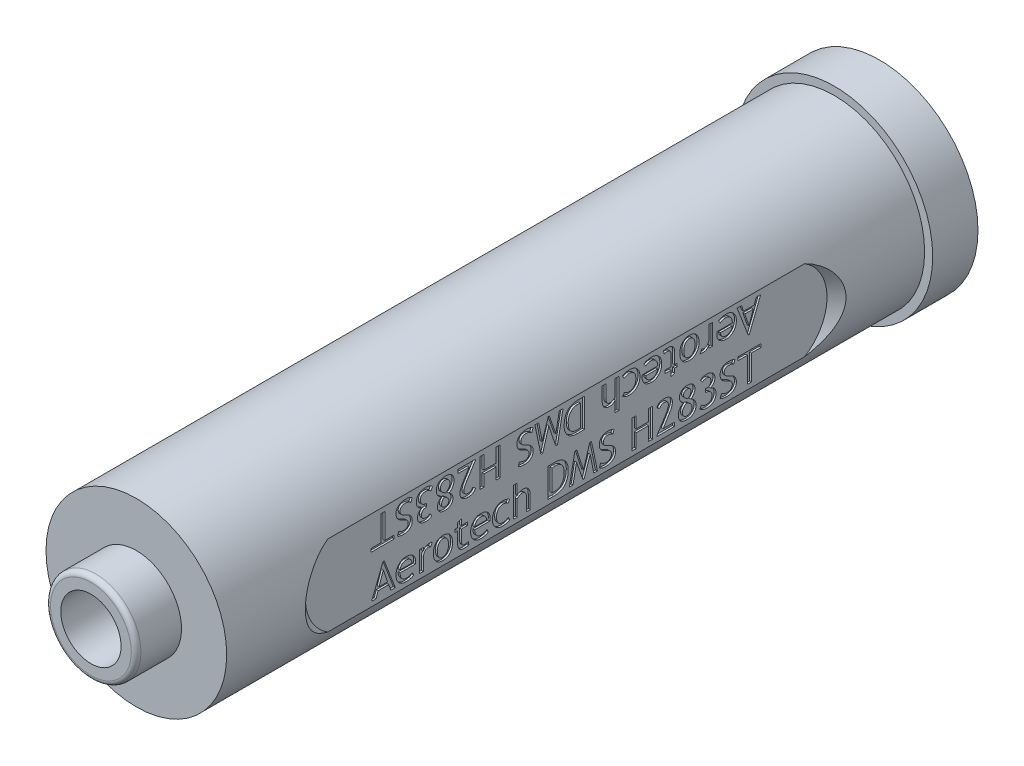
from build123d import *

# Parameters (mm, degrees)
SKETCH1_R           = 19.05
BOSS_EXTRUDE1_DEPTH = 156.718
SKETCH2_R           = 20.7518
BOSS_EXTRUDE2_DEPTH = 9.5504
SKETCH3_R           = 9.525
BOSS_EXTRUDE3_DEPTH = 9.5758
FILLET1_R           = 1.016
SKETCH4_R           = 6.35
CUT_EXTRUDE1_DEPTH  = 18.796
CUT_EXTRUDE2_DEPTH  = 2
CUT_EXTRUDE2_DRAFT  = -45
CUT_EXTRUDE4_DEPTH  = 0.4


with BuildPart() as part:
    # Sketch1 → Boss-Extrude1 (new body)
    with BuildSketch(Plane.XY):
        Circle(SKETCH1_R)
    extrude(amount=BOSS_EXTRUDE1_DEPTH)

    # Sketch2 → Boss-Extrude2 (add)
    with BuildSketch(Plane.XY):
        Circle(SKETCH2_R)
    extrude(amount=BOSS_EXTRUDE2_DEPTH)

    # Sketch3 → Boss-Extrude3 (add)
    with BuildSketch(Plane.XY.offset(156.718)):
        Circle(SKETCH3_R)
    extrude(amount=BOSS_EXTRUDE3_DEPTH)

    # Fillet1
    fillet1_edges = [part.edges().sort_by_distance(p)[0] for p in [
        (-9.525, 0, 166.2938),
    ]]
    fillet(fillet1_edges, radius=FILLET1_R)

    # Sketch4 → Cut-Extrude1 (cut)
    with BuildSketch(Plane.XY.offset(166.2938)):
        Circle(SKETCH4_R)
    extrude(amount=-CUT_EXTRUDE1_DEPTH, mode=Mode.SUBTRACT)

    # Sketch5 → Cut-Revolve1 (revolve, cut)
    with BuildSketch(Plane(origin=(0, 0, 0), x_dir=(0, 0, -1), z_dir=(1, 0, 0))):
        Polygon((0, 0), (0, 8.763), (-14.930069256, 4.7625), (-21.3995, 4.7625), (-22.1996, 5.5626), (-123.4694, 5.5626), (-123.4694, 0), align=None)
    revolve(axis=Axis((0, 0, 36.043340443), (0, 0, 1)), mode=Mode.SUBTRACT)


with BuildPart() as cut_extrude2_tool:
    # Sketch18 → Cut-Extrude2 (with draft: the straight prism first)
    with BuildSketch(Plane(origin=(19.05, 0, 0), x_dir=(0, 0, -1), z_dir=(1, 0, 0))):
        with BuildLine():
            ThreePointArc((-128.1342, 12), (-140.1342, 0), (-128.1342, -12))
            Line((-128.1342, -12), (-38.1342, -12))
            ThreePointArc((-38.1342, -12), (-26.1342, 0), (-38.1342, 12))
            Line((-38.1342, 12), (-128.1342, 12))
        make_face()
    extrude(amount=-CUT_EXTRUDE2_DEPTH)
    # Cut-Extrude2: the draft: its side faces are tilted about the plane it starts from
    cut_extrude2_sides = [cut_extrude2_tool.faces().sort_by_distance(p)[0] for p in [
        (18.05, 0, 140.1342),
        (18.05, -12, 83.1342),
        (18.05, 0, 26.1342),
        (18.05, 12, 83.1342),
    ]]
    draft(cut_extrude2_sides, Plane(origin=(19.05, 0, 0), x_dir=(0, 0, -1), z_dir=(1, 0, 0)), CUT_EXTRUDE2_DRAFT)


with BuildPart() as part_1:
    add(part.part)

    # Cut-Extrude2: cut by cut_extrude2_tool
    add(cut_extrude2_tool.part, mode=Mode.SUBTRACT)

    # Sketch19 → Cut-Extrude4 (cut)
    # profile 1 of 34: a face of its own
    with BuildSketch(Plane(origin=(17.05, 0, 0), x_dir=(0, 0, -1), z_dir=(1, 0, 0))):
        Polygon((-122.212122078, 2.201298701), (-122.212122078, 7.5), (-121.354979221, 7.5), (-121.354979221, 2.201298701), (-119.406927273, 2.201298701), (-119.406927273, 1.5), (-124.238096104, 1.5), (-124.238096104, 2.201298701), align=None)
    # profile 2 of 34: a face of its own
    with BuildSketch(Plane(origin=(17.05, 0, 0), x_dir=(0, 0, -1), z_dir=(1, 0, 0))):
        with BuildLine():
            Line((-115.588745455, 7.188311688), (-115.890693506, 6.409090909))
            add(Edge.make_bspline(
                [(-115.890693506, 6.409090909), (-115.931055394, 6.44200734), (-116.013593018, 6.509319453), (-116.152597475, 6.596314242), (-116.305021361, 6.675333645), (-116.467670876, 6.744255834), (-116.632378068, 6.801726995), (-116.791559996, 6.845379885), (-116.942631363, 6.870853569), (-117.040365988, 6.87474538), (-117.087527922, 6.876623377)],
                knots=[0, 0, 0, 0, 0.955587249, 1.954118219, 3.004079489, 4.105918394, 5.194777333, 6.205278111, 7.13395528, 8, 8, 8, 8], degree=3))
            add(Edge.make_bspline(
                [(-117.087527922, 6.876623377), (-117.126946634, 6.87620378), (-117.20400046, 6.875383573), (-117.316584542, 6.860707409), (-117.423561054, 6.841124977), (-117.524514751, 6.811236478), (-117.619476498, 6.77412842), (-117.708083944, 6.726937261), (-117.791159264, 6.672280868), (-117.867365143, 6.609286281), (-117.935712652, 6.539736339), (-117.995294338, 6.465254129), (-118.047270362, 6.387117563), (-118.088947374, 6.303693891), (-118.12040479, 6.215235086), (-118.143890674, 6.122368922), (-118.157110513, 6.024729605), (-118.159143164, 5.95823556), (-118.160174026, 5.924512987)],
                knots=[0, 0, 0, 0, 1.173820422, 2.29452841, 3.378608084, 4.412044469, 5.427270668, 6.411992502, 7.398273088, 8.386332092, 9.352834118, 10.299221586, 11.225136599, 12.144709654, 13.070624667, 14.018170835, 14.994911834, 16, 16, 16, 16], degree=3))
            add(Edge.make_bspline(
                [(-118.160174026, 5.924512987), (-118.158433674, 5.873633917), (-118.154990197, 5.772964085), (-118.12333328, 5.624794601), (-118.070861219, 5.483016229), (-118.013640254, 5.366802978), (-117.948447226, 5.277735611), (-117.884575145, 5.208159713), (-117.804667495, 5.137713088), (-117.70933341, 5.066457936), (-117.599308145, 4.993079078), (-117.473387873, 4.919699254), (-117.333457272, 4.842285063), (-117.233460795, 4.793378757), (-117.181277922, 4.767857143)],
                knots=[0, 0, 0, 0, 1.130538365, 2.236894411, 3.350406662, 4.488808176, 5.102631719, 5.799026671, 6.585311597, 7.468046219, 8.444340183, 9.524805345, 10.708326798, 12, 12, 12, 12], degree=3))
            Line((-117.181277922, 4.767857143), (-116.695482468, 4.541396104))
            add(Edge.make_bspline(
                [(-116.695482468, 4.541396104), (-116.645714588, 4.51713589), (-116.549060266, 4.470020069), (-116.411987325, 4.392937493), (-116.286258349, 4.312612067), (-116.171988585, 4.22929933), (-116.069889191, 4.142105874), (-115.9794199, 4.051820205), (-115.899650137, 3.958252622), (-115.832353349, 3.859838868), (-115.774987134, 3.757612038), (-115.724134446, 3.651446254), (-115.684043497, 3.539120962), (-115.647514103, 3.42299781), (-115.621013589, 3.301134611), (-115.603670062, 3.17406156), (-115.590314479, 3.042485936), (-115.58927409, 2.952957939), (-115.588745455, 2.907467532)],
                knots=[0, 0, 0, 0, 1.259679526, 2.446426748, 3.576179984, 4.653058672, 5.661766648, 6.6282446, 7.558846239, 8.455419769, 9.33630271, 10.224513612, 11.130314557, 12.047623841, 12.993226619, 13.963623604, 14.965289163, 16, 16, 16, 16], degree=3))
            add(Edge.make_bspline(
                [(-115.588745455, 2.907467532), (-115.589953099, 2.85217978), (-115.592317462, 2.743935709), (-115.616699034, 2.585362689), (-115.653983484, 2.433910334), (-115.706722527, 2.289457001), (-115.773803722, 2.151890689), (-115.85748102, 2.022569569), (-115.955338979, 1.899740583), (-116.068573356, 1.786636878), (-116.191551935, 1.682000254), (-116.325188922, 1.590861111), (-116.468582885, 1.516254536), (-116.618669812, 1.451803052), (-116.777913409, 1.403188375), (-116.945954796, 1.369500971), (-117.122303521, 1.34844278), (-117.242906728, 1.345601165), (-117.304248701, 1.344155844)],
                knots=[0, 0, 0, 0, 1.020190036, 1.997359614, 2.955228544, 3.896418065, 4.831501344, 5.775282982, 6.734997039, 7.725949339, 8.725788016, 9.713106491, 10.705418045, 11.706183111, 12.725491963, 13.77340835, 14.867496748, 16, 16, 16, 16], degree=3))
            add(Edge.make_bspline(
                [(-117.304248701, 1.344155844), (-117.385029195, 1.345057314), (-117.540239773, 1.346789385), (-117.763884066, 1.360823105), (-117.968181181, 1.38678464), (-118.154173107, 1.419317375), (-118.320082292, 1.464787225), (-118.467577364, 1.517387864), (-118.596232635, 1.581385483), (-118.67013137, 1.63497338), (-118.705628571, 1.660714286)],
                knots=[0, 0, 0, 0, 1.327290856, 2.5502392, 3.679258284, 4.70991777, 5.649791681, 6.502102835, 7.280486234, 8, 8, 8, 8], degree=3))
            Line((-118.705628571, 1.660714286), (-118.464557143, 2.357142857))
            add(Edge.make_bspline(
                [(-118.464557143, 2.357142857), (-118.434015373, 2.338725053), (-118.367377621, 2.298540052), (-118.252338859, 2.246371182), (-118.116544478, 2.194085696), (-117.963844288, 2.144487921), (-117.803375317, 2.101740292), (-117.644044109, 2.069767428), (-117.491084453, 2.048969653), (-117.390754777, 2.046604207), (-117.341992208, 2.045454545)],
                knots=[0, 0, 0, 0, 0.726756902, 1.585679099, 2.570802373, 3.693527817, 4.857789208, 5.954938371, 7.006052227, 8, 8, 8, 8], degree=3))
            add(Edge.make_bspline(
                [(-117.341992208, 2.045454545), (-117.308284208, 2.046160808), (-117.242306233, 2.047543202), (-117.145592099, 2.058226071), (-117.054994726, 2.078083228), (-116.969268535, 2.103100386), (-116.890405186, 2.138123359), (-116.815167648, 2.17755097), (-116.746883923, 2.226869765), (-116.66460803, 2.301386493), (-116.57651842, 2.40824618), (-116.499953047, 2.555773393), (-116.453022443, 2.72080021), (-116.448323604, 2.836529904), (-116.445888312, 2.89650974)],
                knots=[0, 0, 0, 0, 0.871587601, 1.705992209, 2.510768249, 3.267661482, 4.010381218, 4.738197868, 5.460394228, 6.18114047, 7.605455475, 9.013596045, 10.452220721, 12, 12, 12, 12], degree=3))
            add(Edge.make_bspline(
                [(-116.445888312, 2.89650974), (-116.446594698, 2.93392082), (-116.447992185, 3.007933502), (-116.46589019, 3.115561679), (-116.492625219, 3.218528704), (-116.530467166, 3.315622786), (-116.577562571, 3.406847936), (-116.634284684, 3.490336445), (-116.698722432, 3.566418255), (-116.761662218, 3.623321369), (-116.819316014, 3.668402789), (-116.87370818, 3.704909121), (-116.93761466, 3.744434128), (-117.011688036, 3.787883328), (-117.096398014, 3.832901669), (-117.190234411, 3.883819854), (-117.295154351, 3.935410049), (-117.368365944, 3.971200885), (-117.406521429, 3.989853896)],
                knots=[0, 0, 0, 0, 1.149398368, 2.273926756, 3.345679902, 4.416560522, 5.471686112, 6.496399944, 7.514478786, 8.530413012, 9.099664687, 9.764364817, 10.543644884, 11.410649299, 12.404804611, 13.493646896, 14.693770861, 16, 16, 16, 16], degree=3))
            Line((-117.406521429, 3.989853896), (-117.90083961, 4.224837662))
            add(Edge.make_bspline(
                [(-117.90083961, 4.224837662), (-117.950688097, 4.248956551), (-118.04817803, 4.296126465), (-118.184950239, 4.375709717), (-118.31129421, 4.456758944), (-118.425022507, 4.542939722), (-118.52881225, 4.631052591), (-118.620640184, 4.723805546), (-118.700240132, 4.820589255), (-118.769174064, 4.921208319), (-118.828022565, 5.027456511), (-118.879290414, 5.139270465), (-118.921724549, 5.25838327), (-118.957398332, 5.383938171), (-118.983541529, 5.516793599), (-119.002958181, 5.656204398), (-119.015635715, 5.802119851), (-119.016749505, 5.90175895), (-119.017316883, 5.952516234)],
                knots=[0, 0, 0, 0, 1.207099782, 2.360755283, 3.448152068, 4.47825816, 5.469819068, 6.414749437, 7.32010401, 8.198856951, 9.07045089, 9.965452247, 10.878044257, 11.825003042, 12.809071688, 13.827825033, 14.893469503, 16, 16, 16, 16], degree=3))
            add(Edge.make_bspline(
                [(-119.017316883, 5.952516234), (-119.015730042, 6.008215392), (-119.012608486, 6.117784045), (-118.986279778, 6.279247656), (-118.942455891, 6.434025601), (-118.881238872, 6.582394768), (-118.80237406, 6.723471288), (-118.70666533, 6.8579953), (-118.59375147, 6.9865601), (-118.464196189, 7.107419913), (-118.319995377, 7.217775367), (-118.163309472, 7.314318819), (-117.995043061, 7.396601778), (-117.814772147, 7.463479269), (-117.622444407, 7.513786867), (-117.419573279, 7.552171854), (-117.204480247, 7.573873753), (-117.057136986, 7.57655008), (-116.981602597, 7.577922078)],
                knots=[0, 0, 0, 0, 0.918229556, 1.806296171, 2.68988645, 3.566246584, 4.44719609, 5.349825016, 6.284281999, 7.264602444, 8.267358549, 9.274194767, 10.295018407, 11.351877198, 12.439738183, 13.570097331, 14.754329091, 16, 16, 16, 16], degree=3))
            add(Edge.make_bspline(
                [(-116.981602597, 7.577922078), (-116.915002483, 7.576777373), (-116.783576169, 7.574518452), (-116.590341105, 7.555935286), (-116.404392234, 7.525662457), (-116.22610616, 7.483059089), (-116.055104431, 7.428218811), (-115.891740225, 7.361314433), (-115.735668395, 7.281942936), (-115.637781652, 7.219561541), (-115.588745455, 7.188311688)],
                knots=[0, 0, 0, 0, 1.088633433, 2.148270768, 3.170329357, 4.166474596, 5.142169714, 6.103226757, 7.04981468, 8, 8, 8, 8], degree=3))
        make_face()
    # profile 3 of 34: a face of its own
    with BuildSketch(Plane(origin=(17.05, 0, 0), x_dir=(0, 0, -1), z_dir=(1, 0, 0))):
        with BuildLine():
            Line((-111.303031169, 7.032467532), (-111.692641558, 6.409090909))
            add(Edge.make_bspline(
                [(-111.692641558, 6.409090909), (-111.726746137, 6.446428381), (-111.793895621, 6.519943202), (-111.906912099, 6.614692899), (-112.025626513, 6.696196846), (-112.151941328, 6.762315339), (-112.285190295, 6.813548653), (-112.424837798, 6.850009932), (-112.570959647, 6.872665377), (-112.670642524, 6.875286992), (-112.721456494, 6.876623377)],
                knots=[0, 0, 0, 0, 1.038536857, 2.044805075, 3.023619178, 3.993862689, 4.968400918, 5.951861625, 6.955948661, 8, 8, 8, 8], degree=3))
            add(Edge.make_bspline(
                [(-112.721456494, 6.876623377), (-112.768149615, 6.875519941), (-112.85845059, 6.873385979), (-112.989637944, 6.861780186), (-113.111402839, 6.839900834), (-113.224264189, 6.809403567), (-113.328744538, 6.770842885), (-113.423433678, 6.721803019), (-113.510362966, 6.665646309), (-113.587145349, 6.599187709), (-113.656014065, 6.524868988), (-113.71455365, 6.440926658), (-113.764974979, 6.349312598), (-113.804988787, 6.248119585), (-113.836576104, 6.138884582), (-113.858092139, 6.020570326), (-113.871618141, 5.893982911), (-113.87349372, 5.806448433), (-113.87445974, 5.761363636)],
                knots=[0, 0, 0, 0, 1.217979382, 2.355480244, 3.430963224, 4.4400711, 5.401418145, 6.329258424, 7.215851497, 8.09412851, 8.97061781, 9.851633177, 10.756363982, 11.691960197, 12.683540408, 13.71738136, 14.824333005, 16, 16, 16, 16], degree=3))
            add(Edge.make_bspline(
                [(-113.87445974, 5.761363636), (-113.873799393, 5.719895069), (-113.87250505, 5.638612681), (-113.854251279, 5.52013233), (-113.82796598, 5.406980758), (-113.790119806, 5.300149041), (-113.742296428, 5.198518177), (-113.682582985, 5.104012201), (-113.612042462, 5.015386281), (-113.532344519, 4.932637165), (-113.442309957, 4.859167484), (-113.345569796, 4.79380521), (-113.241379435, 4.739034754), (-113.130268269, 4.69338915), (-113.011488917, 4.660365277), (-112.886813535, 4.633911127), (-112.754663285, 4.619634932), (-112.664263222, 4.61781511), (-112.617966234, 4.616883117)],
                knots=[0, 0, 0, 0, 1.039781775, 2.038072477, 3.001615985, 3.951986008, 4.876904945, 5.815188847, 6.750593211, 7.715858101, 8.692716095, 9.661735851, 10.641404495, 11.64203099, 12.670424563, 13.731199182, 14.838068919, 16, 16, 16, 16], degree=3))
            Line((-112.617966234, 4.616883117), (-112.549784416, 4.616883117))
            Line((-112.549784416, 4.616883117), (-112.549784416, 3.915584416))
            Line((-112.549784416, 3.915584416), (-112.587527922, 3.915584416))
            add(Edge.make_bspline(
                [(-112.587527922, 3.915584416), (-112.630175192, 3.914979958), (-112.712777778, 3.913809198), (-112.832211094, 3.902086349), (-112.943710699, 3.886405109), (-113.04629822, 3.859731168), (-113.142022123, 3.829322905), (-113.22846388, 3.788497884), (-113.307407888, 3.742001309), (-113.378548844, 3.688927464), (-113.439552286, 3.62680423), (-113.494205545, 3.559197182), (-113.540379629, 3.484038582), (-113.576913772, 3.400644716), (-113.60659383, 3.311114207), (-113.624645135, 3.213569051), (-113.639594722, 3.110030945), (-113.640319941, 3.03821199), (-113.640693506, 3.001217532)],
                knots=[0, 0, 0, 0, 1.280729984, 2.480618509, 3.603185272, 4.658871468, 5.661325427, 6.615925196, 7.523423809, 8.41104778, 9.273184394, 10.131952094, 11.018570638, 11.913616274, 12.862123289, 13.8448834, 14.889884024, 16, 16, 16, 16], degree=3))
            add(Edge.make_bspline(
                [(-113.640693506, 3.001217532), (-113.639996334, 2.962642343), (-113.638643016, 2.887762082), (-113.628092521, 2.778905468), (-113.608193305, 2.678138377), (-113.583059485, 2.584040374), (-113.549189253, 2.497830529), (-113.507041437, 2.418910324), (-113.458826019, 2.346858132), (-113.402016404, 2.282421788), (-113.337036719, 2.226994569), (-113.266031538, 2.176850562), (-113.185688649, 2.137692844), (-113.099433417, 2.102663607), (-113.004676405, 2.078216112), (-112.903608858, 2.058001998), (-112.794323683, 2.047479508), (-112.719040051, 2.046145339), (-112.68006039, 2.045454545)],
                knots=[0, 0, 0, 0, 1.190816825, 2.311555071, 3.37057964, 4.358439532, 5.314648657, 6.222609832, 7.115667526, 7.985485622, 8.864726834, 9.747442442, 10.660747145, 11.616956271, 12.616897868, 13.675922438, 14.796660683, 16, 16, 16, 16], degree=3))
            add(Edge.make_bspline(
                [(-112.68006039, 2.045454545), (-112.637402881, 2.046338596), (-112.554260417, 2.048061673), (-112.43323202, 2.062924542), (-112.319069381, 2.087187647), (-112.211398377, 2.121398415), (-112.109940764, 2.164986065), (-112.015562537, 2.219355987), (-111.927032249, 2.28219178), (-111.874705323, 2.332123448), (-111.848485714, 2.357142857)],
                knots=[0, 0, 0, 0, 1.121648649, 2.186171593, 3.201608459, 4.187379892, 5.153123794, 6.099801165, 7.047861733, 8, 8, 8, 8], degree=3))
            Line((-111.848485714, 2.357142857), (-111.458875325, 1.811688312))
            add(Edge.make_bspline(
                [(-111.458875325, 1.811688312), (-111.492368697, 1.774144308), (-111.559538526, 1.698851073), (-111.68005181, 1.603065299), (-111.816028647, 1.522974564), (-111.967622868, 1.456600819), (-112.135292033, 1.406052546), (-112.318806343, 1.370046068), (-112.517995938, 1.347958812), (-112.656055887, 1.345453243), (-112.727544156, 1.344155844)],
                knots=[0, 0, 0, 0, 0.862607143, 1.729929554, 2.629782977, 3.565816174, 4.56429535, 5.630205842, 6.772906386, 8, 8, 8, 8], degree=3))
            add(Edge.make_bspline(
                [(-112.727544156, 1.344155844), (-112.791328209, 1.345046798), (-112.916411486, 1.346793996), (-113.099061052, 1.368655481), (-113.273087584, 1.400869845), (-113.437816774, 1.44706177), (-113.593600311, 1.506922958), (-113.739932188, 1.580604929), (-113.878866062, 1.665404227), (-114.005489353, 1.765524793), (-114.121231027, 1.874048296), (-114.22159315, 1.991964388), (-114.30804227, 2.116606112), (-114.377258747, 2.249792104), (-114.431473877, 2.39030763), (-114.470175032, 2.537671282), (-114.494189029, 2.692799084), (-114.49660295, 2.79861236), (-114.497836364, 2.852678571)],
                knots=[0, 0, 0, 0, 1.173870012, 2.302009658, 3.382200846, 4.430273448, 5.447547431, 6.450167701, 7.443526661, 8.439131898, 9.417079347, 10.360584739, 11.285075779, 12.204296259, 13.117482204, 14.052813417, 15.005068113, 16, 16, 16, 16], degree=3))
            add(Edge.make_bspline(
                [(-114.497836364, 2.852678571), (-114.49669643, 2.894096665), (-114.494445314, 2.9758882), (-114.482707074, 3.096928405), (-114.460415994, 3.214075462), (-114.429971913, 3.327647747), (-114.390965889, 3.438209079), (-114.342056019, 3.544465461), (-114.286094287, 3.648065492), (-114.199180856, 3.776697319), (-114.079595949, 3.922797123), (-113.921488183, 4.071762729), (-113.749502413, 4.189207137), (-113.624695658, 4.240689989), (-113.562771429, 4.266233766)],
                knots=[0, 0, 0, 0, 0.82800859, 1.635133057, 2.42740663, 3.208556794, 3.983363946, 4.767456623, 5.544299174, 6.333952416, 7.866917947, 9.307502361, 10.664088002, 12, 12, 12, 12], degree=3))
            add(Edge.make_bspline(
                [(-113.562771429, 4.266233766), (-113.606419026, 4.28106288), (-113.692767907, 4.310399602), (-113.816857143, 4.364189235), (-113.934189263, 4.424984192), (-114.044270409, 4.493707176), (-114.147954234, 4.568995902), (-114.244515293, 4.652028401), (-114.333617374, 4.742831129), (-114.416358604, 4.839684142), (-114.490795469, 4.943320143), (-114.556029259, 5.052974623), (-114.608443668, 5.169230795), (-114.655079276, 5.288953587), (-114.68810337, 5.415399668), (-114.71434149, 5.546571837), (-114.728793681, 5.683523308), (-114.730656983, 5.776349204), (-114.731602597, 5.823457792)],
                knots=[0, 0, 0, 0, 1.055489036, 2.088094254, 3.094252792, 4.079584822, 5.057566973, 6.026495184, 6.992744325, 7.968736504, 8.941269751, 9.912157914, 10.885357295, 11.859089255, 12.851281399, 13.874007011, 14.921071234, 16, 16, 16, 16], degree=3))
            add(Edge.make_bspline(
                [(-114.731602597, 5.823457792), (-114.729971186, 5.891715345), (-114.726804194, 6.02422095), (-114.702128502, 6.21711652), (-114.661258028, 6.398032509), (-114.602486045, 6.566958432), (-114.52776989, 6.724378936), (-114.436616582, 6.870162379), (-114.326472048, 7.002223913), (-114.202348111, 7.123631828), (-114.061389504, 7.230293127), (-113.908060809, 7.324636426), (-113.740223918, 7.402644025), (-113.559750441, 7.467323677), (-113.365123664, 7.516494026), (-113.158117486, 7.553381888), (-112.93736391, 7.573620748), (-112.786024777, 7.576459644), (-112.708063636, 7.577922078)],
                knots=[0, 0, 0, 0, 1.07672325, 2.090198951, 3.062605322, 3.998219386, 4.906186634, 5.806921858, 6.703070255, 7.613292765, 8.540564462, 9.486139916, 10.448628272, 11.45528379, 12.506747278, 13.612164627, 14.76992575, 16, 16, 16, 16], degree=3))
            add(Edge.make_bspline(
                [(-112.708063636, 7.577922078), (-112.640979991, 7.576147611), (-112.506528146, 7.572591149), (-112.306769207, 7.540604547), (-112.108810434, 7.490866084), (-111.917328344, 7.42004401), (-111.735738502, 7.338131292), (-111.572114833, 7.244844343), (-111.42613524, 7.146507769), (-111.343163923, 7.069645415), (-111.303031169, 7.032467532)],
                knots=[0, 0, 0, 0, 1.044046157, 2.09252095, 3.142537548, 4.218148357, 5.267403853, 6.241031861, 7.14919712, 8, 8, 8, 8], degree=3))
        make_face()
    # profile 4 of 34: a face of its own
    with BuildSketch(Plane(origin=(17.05, 0, 0), x_dir=(0, 0, -1), z_dir=(1, 0, 0))):
        with BuildLine():
            add(Edge.make_bspline(
                [(-107.868372078, 4.133522727), (-107.807710441, 4.097262031), (-107.687080787, 4.025155251), (-107.524079189, 3.890693622), (-107.37929676, 3.735348873), (-107.253312503, 3.563181797), (-107.147955071, 3.380187118), (-107.073585655, 3.189725518), (-107.025381288, 2.996302153), (-107.020000271, 2.865535132), (-107.017316883, 2.800324675)],
                knots=[0, 0, 0, 0, 1.024047665, 2.036386098, 3.052653966, 4.097076018, 5.125210636, 6.105829522, 7.055421457, 8, 8, 8, 8], degree=3))
            add(Edge.make_bspline(
                [(-107.017316883, 2.800324675), (-107.018820284, 2.745887111), (-107.021770928, 2.639045377), (-107.041932803, 2.482928356), (-107.078835011, 2.336159694), (-107.129387831, 2.198412229), (-107.192315801, 2.068071365), (-107.272136912, 1.947631021), (-107.365543405, 1.835633946), (-107.472506941, 1.733951713), (-107.590939948, 1.642991375), (-107.717236244, 1.562289047), (-107.852731453, 1.494571615), (-107.996721079, 1.440692195), (-108.148203842, 1.395798586), (-108.30858985, 1.366240375), (-108.477091116, 1.347413437), (-108.59234508, 1.345257588), (-108.651245455, 1.344155844)],
                knots=[0, 0, 0, 0, 1.060150373, 2.080701166, 3.058328791, 4.000986203, 4.934152696, 5.870193254, 6.80726765, 7.768788281, 8.737880312, 9.711409925, 10.683430462, 11.681577399, 12.702097587, 13.756161375, 14.853289473, 16, 16, 16, 16], degree=3))
            add(Edge.make_bspline(
                [(-108.651245455, 1.344155844), (-108.714608689, 1.34522601), (-108.837554971, 1.347302497), (-109.01658465, 1.366189219), (-109.185095652, 1.395569387), (-109.342429136, 1.440108476), (-109.489277836, 1.494152058), (-109.624964579, 1.561756283), (-109.748933043, 1.64250363), (-109.862934841, 1.733331348), (-109.962976949, 1.836717851), (-110.050892675, 1.948213254), (-110.12452759, 2.069494738), (-110.186363522, 2.198793642), (-110.231329022, 2.338363786), (-110.266591034, 2.4855231), (-110.28534467, 2.641971121), (-110.288453582, 2.749145146), (-110.290044156, 2.803977273)],
                knots=[0, 0, 0, 0, 1.222375752, 2.371825795, 3.470194905, 4.519090049, 5.522803766, 6.485978013, 7.437459514, 8.373145267, 9.29249717, 10.207435195, 11.107367679, 12.025250647, 12.966361468, 13.931412475, 14.941674041, 16, 16, 16, 16], degree=3))
            add(Edge.make_bspline(
                [(-110.290044156, 2.803977273), (-110.28702228, 2.870831434), (-110.280881822, 3.006679239), (-110.228617526, 3.209500575), (-110.147385101, 3.413715906), (-110.035168644, 3.613133391), (-109.903877835, 3.801264068), (-109.759620387, 3.967708225), (-109.603689338, 4.107543544), (-109.489177873, 4.1796572), (-109.432901299, 4.215097403)],
                knots=[0, 0, 0, 0, 0.933192181, 1.896248607, 2.90956271, 3.998797018, 5.086198294, 6.111272295, 7.07178617, 8, 8, 8, 8], degree=3))
            add(Edge.make_bspline(
                [(-109.432901299, 4.215097403), (-109.476919148, 4.240756991), (-109.563535456, 4.291248755), (-109.687845422, 4.370950998), (-109.802819053, 4.455748334), (-109.909253621, 4.542745258), (-110.00821556, 4.632392132), (-110.097353223, 4.725446621), (-110.17905293, 4.821531721), (-110.251524863, 4.920404782), (-110.315291658, 5.022800129), (-110.3721504, 5.127078504), (-110.417457918, 5.236163702), (-110.457527812, 5.346644235), (-110.485974662, 5.461068518), (-110.508694708, 5.577562585), (-110.520406768, 5.697816504), (-110.52266615, 5.778794686), (-110.52381039, 5.819805195)],
                knots=[0, 0, 0, 0, 1.196867709, 2.355141481, 3.466846567, 4.550857632, 5.583377784, 6.60153698, 7.575670063, 8.544376179, 9.478157679, 10.407988558, 11.330606581, 12.250264325, 13.165960144, 14.097158565, 15.036326891, 16, 16, 16, 16], degree=3))
            add(Edge.make_bspline(
                [(-110.52381039, 5.819805195), (-110.521991973, 5.88763135), (-110.518442264, 6.020033971), (-110.496167136, 6.212733516), (-110.454705507, 6.393270278), (-110.401649421, 6.563203177), (-110.328097753, 6.71992274), (-110.24218121, 6.866485436), (-110.137572781, 6.999297762), (-110.018812276, 7.120585209), (-109.886641506, 7.228610943), (-109.741022954, 7.322141518), (-109.583540168, 7.400700047), (-109.415203005, 7.467153654), (-109.234691267, 7.516830875), (-109.042725885, 7.551399141), (-108.838880137, 7.574109923), (-108.698792679, 7.576629131), (-108.626894805, 7.577922078)],
                knots=[0, 0, 0, 0, 1.109486173, 2.165814594, 3.165856119, 4.135656813, 5.071210086, 5.991018696, 6.908525143, 7.82852534, 8.762593925, 9.694253713, 10.653088626, 11.636738195, 12.649737114, 13.709501097, 14.82443436, 16, 16, 16, 16], degree=3))
            add(Edge.make_bspline(
                [(-108.626894805, 7.577922078), (-108.552574983, 7.576511056), (-108.408099989, 7.573768083), (-108.198525029, 7.552865776), (-108.003419793, 7.51939042), (-107.822580638, 7.47217989), (-107.656348018, 7.4097228), (-107.503504749, 7.33489542), (-107.365399014, 7.244875101), (-107.241781801, 7.141510385), (-107.133874096, 7.022896143), (-107.039473072, 6.892022823), (-106.959655811, 6.746918933), (-106.895894352, 6.587553841), (-106.843979976, 6.41540763), (-106.810120717, 6.229137994), (-106.787233149, 6.029790602), (-106.784804676, 5.892115869), (-106.783550649, 5.821022727)],
                knots=[0, 0, 0, 0, 1.221138243, 2.373847706, 3.457152732, 4.471457006, 5.440160331, 6.370737218, 7.262355914, 8.142754414, 9.011301491, 9.890486624, 10.788963262, 11.725258326, 12.706462155, 13.738481551, 14.832186217, 16, 16, 16, 16], degree=3))
            add(Edge.make_bspline(
                [(-106.783550649, 5.821022727), (-106.7844943, 5.778773367), (-106.78638716, 5.694025752), (-106.801559838, 5.567438931), (-106.825757676, 5.441631526), (-106.860634431, 5.316507508), (-106.903762562, 5.191128269), (-106.959413542, 5.067294771), (-107.022856857, 4.943520196), (-107.095278288, 4.821975922), (-107.174410428, 4.704845837), (-107.260186224, 4.596447231), (-107.349156318, 4.495979448), (-107.442828443, 4.403953037), (-107.542739868, 4.32270469), (-107.64683465, 4.250802475), (-107.754491342, 4.186086562), (-107.830276682, 4.151106387), (-107.868372078, 4.133522727)],
                knots=[0, 0, 0, 0, 0.960418542, 1.926494974, 2.894728566, 3.87080188, 4.877666105, 5.906450348, 6.954749453, 8.038829842, 9.121495392, 10.166377182, 11.179480619, 12.1713909, 13.148554141, 14.103370453, 15.046611719, 16, 16, 16, 16], degree=3))
        make_face()
        with BuildLine():
            add(Edge.make_bspline(
                [(-108.874053896, 3.877840909), (-108.918654161, 3.834332312), (-109.005122854, 3.749980085), (-109.118547738, 3.615021174), (-109.215364954, 3.480259405), (-109.294479821, 3.343817094), (-109.355819135, 3.205824899), (-109.399606055, 3.066564399), (-109.428379498, 2.926098536), (-109.431393566, 2.831711921), (-109.432901299, 2.784496753)],
                knots=[0, 0, 0, 0, 1.183418859, 2.294351491, 3.345106629, 4.333286579, 5.286289948, 6.20829997, 7.103735009, 8, 8, 8, 8], degree=3))
            add(Edge.make_bspline(
                [(-109.432901299, 2.784496753), (-109.430701465, 2.730612493), (-109.426462177, 2.626772434), (-109.383514806, 2.480511599), (-109.315297879, 2.350757159), (-109.219335972, 2.241143428), (-109.101814822, 2.152895753), (-108.966007695, 2.090415544), (-108.814936871, 2.051350445), (-108.708719183, 2.047466884), (-108.653680519, 2.045454545)],
                knots=[0, 0, 0, 0, 1.067444683, 2.057066732, 2.998046611, 3.957818562, 4.924870808, 5.894672559, 6.909085577, 8, 8, 8, 8], degree=3))
            add(Edge.make_bspline(
                [(-108.653680519, 2.045454545), (-108.59263686, 2.047719085), (-108.477595335, 2.051986786), (-108.316353962, 2.085273151), (-108.178492231, 2.143605227), (-108.066013316, 2.228449086), (-107.977928936, 2.33648059), (-107.916702781, 2.468581629), (-107.880362578, 2.623476058), (-107.876501848, 2.734365317), (-107.87445974, 2.793019481)],
                knots=[0, 0, 0, 0, 1.183476817, 2.230354132, 3.175169811, 4.063178808, 4.936124976, 5.851658333, 6.863648447, 8, 8, 8, 8], degree=3))
            add(Edge.make_bspline(
                [(-107.87445974, 2.793019481), (-107.877733436, 2.83923856), (-107.884438345, 2.933900591), (-107.934005438, 3.073965396), (-108.014277538, 3.211926384), (-108.125777551, 3.348737686), (-108.268746231, 3.483485924), (-108.442234522, 3.617379401), (-108.646095987, 3.751082752), (-108.795548308, 3.834187132), (-108.874053896, 3.877840909)],
                knots=[0, 0, 0, 0, 0.718613735, 1.471804208, 2.28676854, 3.194503089, 4.208830416, 5.338647039, 6.602021846, 8, 8, 8, 8], degree=3))
        make_face(mode=Mode.SUBTRACT)
        with BuildLine():
            add(Edge.make_bspline(
                [(-108.542885065, 4.491477273), (-108.471233124, 4.532489983), (-108.333155292, 4.611524074), (-108.149247469, 4.752302881), (-107.991427681, 4.90156371), (-107.863143278, 5.06402188), (-107.763049998, 5.237413397), (-107.691741246, 5.42168299), (-107.649208079, 5.617392558), (-107.643570479, 5.751412386), (-107.640693506, 5.819805195)],
                knots=[0, 0, 0, 0, 1.169081371, 2.252893893, 3.274090425, 4.240801742, 5.176232416, 6.101382733, 7.031100313, 8, 8, 8, 8], degree=3))
            add(Edge.make_bspline(
                [(-107.640693506, 5.819805195), (-107.641816947, 5.856759538), (-107.644008224, 5.928839155), (-107.655680549, 6.034994642), (-107.678599716, 6.136030572), (-107.706486373, 6.233760924), (-107.746701188, 6.325806485), (-107.793871143, 6.413714622), (-107.850343394, 6.49677313), (-107.914371949, 6.574638586), (-107.986149787, 6.644282589), (-108.061677406, 6.707726961), (-108.1437513, 6.759957803), (-108.230677709, 6.8028992), (-108.322591527, 6.836010922), (-108.419860518, 6.858769084), (-108.521711047, 6.87397404), (-108.591530486, 6.875732631), (-108.626894805, 6.876623377)],
                knots=[0, 0, 0, 0, 1.096261491, 2.138263131, 3.160405945, 4.165616059, 5.146983805, 6.132475581, 7.120536136, 8.120617778, 9.116344907, 10.082540549, 11.040682225, 11.993366088, 12.952716395, 13.930609477, 14.951830771, 16, 16, 16, 16], degree=3))
            add(Edge.make_bspline(
                [(-108.626894805, 6.876623377), (-108.663866721, 6.875619439), (-108.736432454, 6.873648984), (-108.84287462, 6.860171815), (-108.944229759, 6.837479835), (-109.040032352, 6.803575125), (-109.131694071, 6.763017672), (-109.217725976, 6.710656097), (-109.299077311, 6.650162821), (-109.374515156, 6.580741734), (-109.442296162, 6.504218864), (-109.502652657, 6.422134279), (-109.553806704, 6.334467879), (-109.595527208, 6.241418638), (-109.626883539, 6.143262903), (-109.650502067, 6.040310295), (-109.663626456, 5.931751242), (-109.665641314, 5.857581665), (-109.666667532, 5.819805195)],
                knots=[0, 0, 0, 0, 1.067553266, 2.095314372, 3.093239623, 4.06062207, 5.025729992, 5.982475656, 6.962273611, 7.949334601, 8.937230198, 9.910063927, 10.88698373, 11.86277805, 12.848655471, 13.858008634, 14.909028785, 16, 16, 16, 16], degree=3))
            add(Edge.make_bspline(
                [(-109.666667532, 5.819805195), (-109.664478162, 5.764784818), (-109.66011158, 5.655049666), (-109.619829216, 5.493483015), (-109.557674831, 5.336586931), (-109.484184868, 5.210049769), (-109.406976426, 5.110477304), (-109.332193025, 5.031177177), (-109.239985551, 4.950157284), (-109.132185209, 4.865147663), (-109.009472685, 4.774699978), (-108.869037974, 4.682463904), (-108.711453019, 4.588063296), (-108.600627012, 4.524562239), (-108.542885065, 4.491477273)],
                knots=[0, 0, 0, 0, 1.076759129, 2.147537608, 3.243515697, 4.377177738, 5.000860155, 5.709900342, 6.509841506, 7.404255972, 8.400184218, 9.496624039, 10.695705026, 12, 12, 12, 12], degree=3))
        make_face(mode=Mode.SUBTRACT)
    # profile 5 of 34: a face of its own
    with BuildSketch(Plane(origin=(17.05, 0, 0), x_dir=(0, 0, -1), z_dir=(1, 0, 0))):
        with BuildLine():
            Line((-102.26407013, 7.5), (-102.26407013, 7.334415584))
            Line((-102.26407013, 7.334415584), (-104.102544156, 4.431818182))
            add(Edge.make_bspline(
                [(-104.102544156, 4.431818182), (-104.148290685, 4.357551693), (-104.2367163, 4.213998509), (-104.35394643, 3.998549821), (-104.454404983, 3.792666148), (-104.535215933, 3.594012586), (-104.599289318, 3.404711208), (-104.644418412, 3.223114538), (-104.67483672, 3.05054057), (-104.678086269, 2.937615889), (-104.679654545, 2.883116883)],
                knots=[0, 0, 0, 0, 1.251109102, 2.41832753, 3.517216129, 4.535673931, 5.49305684, 6.381252223, 7.218770041, 8, 8, 8, 8], degree=3))
            add(Edge.make_bspline(
                [(-104.679654545, 2.883116883), (-104.678828411, 2.849421879), (-104.677222347, 2.78391635), (-104.66838891, 2.68834074), (-104.649084705, 2.600004549), (-104.627114758, 2.516915769), (-104.594907555, 2.441767397), (-104.55710289, 2.372433753), (-104.511634246, 2.309886717), (-104.459311436, 2.253839957), (-104.399933287, 2.204448672), (-104.333624787, 2.161760264), (-104.26063434, 2.125177674), (-104.180414955, 2.096145299), (-104.093754337, 2.072690664), (-103.999873931, 2.057674577), (-103.899434019, 2.047590594), (-103.830249704, 2.046182157), (-103.794508442, 2.045454545)],
                knots=[0, 0, 0, 0, 1.157471426, 2.250208337, 3.288816236, 4.259369899, 5.196323103, 6.088357633, 6.966457551, 7.844004336, 8.714774597, 9.611586366, 10.546464367, 11.512102786, 12.536399958, 13.624684332, 14.772889773, 16, 16, 16, 16], degree=3))
            add(Edge.make_bspline(
                [(-103.794508442, 2.045454545), (-103.742789541, 2.047513893), (-103.640313054, 2.051594309), (-103.489144456, 2.08599382), (-103.343941767, 2.142514302), (-103.205980802, 2.219307336), (-103.079128862, 2.311326069), (-102.969606324, 2.418609975), (-102.877673175, 2.537188009), (-102.832197827, 2.625033207), (-102.809524675, 2.668831169)],
                knots=[0, 0, 0, 0, 1.010378377, 2.001976546, 3.014440844, 4.048081227, 5.081386452, 6.069070967, 7.037275152, 8, 8, 8, 8], degree=3))
            Line((-102.809524675, 2.668831169), (-102.26407013, 2.230519481))
            add(Edge.make_bspline(
                [(-102.26407013, 2.230519481), (-102.275990579, 2.197369678), (-102.299712823, 2.131400041), (-102.346876638, 2.037757863), (-102.400355886, 1.948153216), (-102.462506012, 1.863938302), (-102.533827089, 1.78558814), (-102.613292544, 1.712822101), (-102.699770838, 1.643930721), (-102.794894455, 1.582620225), (-102.895854085, 1.526195878), (-103.0031238, 1.47777821), (-103.115438225, 1.436412146), (-103.23243991, 1.401842162), (-103.355218969, 1.377070784), (-103.482664301, 1.356951574), (-103.615753498, 1.346285006), (-103.706018035, 1.344873327), (-103.751894805, 1.344155844)],
                knots=[0, 0, 0, 0, 0.911426009, 1.813779847, 2.709500447, 3.611180909, 4.518842936, 5.448444672, 6.398725029, 7.378078945, 8.375311876, 9.391142188, 10.421865952, 11.472749887, 12.546555824, 13.662721216, 14.812082734, 16, 16, 16, 16], degree=3))
            add(Edge.make_bspline(
                [(-103.751894805, 1.344155844), (-103.820138032, 1.345088309), (-103.952862081, 1.34690183), (-104.145911331, 1.367751228), (-104.327837438, 1.396647328), (-104.497900692, 1.441171956), (-104.657312534, 1.496589963), (-104.804508809, 1.566436696), (-104.941434314, 1.646916415), (-105.065373187, 1.740733553), (-105.176888845, 1.845642006), (-105.274121973, 1.961726554), (-105.354152412, 2.08989149), (-105.422234733, 2.2264282), (-105.472565194, 2.374127939), (-105.511090549, 2.53079942), (-105.532781708, 2.698662123), (-105.535434127, 2.814063354), (-105.536797403, 2.873376623)],
                knots=[0, 0, 0, 0, 1.227942827, 2.388186338, 3.491989194, 4.541022658, 5.548502097, 6.525698314, 7.469184556, 8.402889349, 9.317651287, 10.220342544, 11.120250361, 12.031855923, 12.960717563, 13.922914033, 14.932431164, 16, 16, 16, 16], degree=3))
            add(Edge.make_bspline(
                [(-105.536797403, 2.873376623), (-105.534784193, 2.931925078), (-105.530622914, 3.05294398), (-105.499455303, 3.239663865), (-105.448854117, 3.436837192), (-105.37905083, 3.645075758), (-105.288988883, 3.863788439), (-105.180268028, 4.093645221), (-105.052501942, 4.335350391), (-104.955227571, 4.496815497), (-104.904898052, 4.580357143)],
                knots=[0, 0, 0, 0, 0.763040377, 1.577194641, 2.461317141, 3.414970863, 4.437739499, 5.543008971, 6.72875893, 8, 8, 8, 8], degree=3))
            Line((-104.904898052, 4.580357143), (-103.588745455, 6.720779221))
            Line((-103.588745455, 6.720779221), (-105.926407792, 6.720779221))
            Line((-105.926407792, 6.720779221), (-105.926407792, 7.5))
            Line((-105.926407792, 7.5), (-102.26407013, 7.5))
        make_face()
    # profile 6 of 34: a face of its own
    with BuildSketch(Plane(origin=(17.05, 0, 0), x_dir=(0, 0, -1), z_dir=(1, 0, 0))):
        Polygon((-100.471862338, 7.5), (-100.471862338, 4.616883117), (-97.900433766, 4.616883117), (-97.900433766, 7.5), (-97.043290909, 7.5), (-97.043290909, 1.5), (-97.900433766, 1.5), (-97.900433766, 3.915584416), (-100.471862338, 3.915584416), (-100.471862338, 1.5), (-101.329005195, 1.5), (-101.329005195, 7.5), align=None)
    # profile 7 of 34: a face of its own
    with BuildSketch(Plane(origin=(17.05, 0, 0), x_dir=(0, 0, -1), z_dir=(1, 0, 0))):
        with BuildLine():
            Line((-90.108225974, 7.188311688), (-90.410174026, 6.409090909))
            add(Edge.make_bspline(
                [(-90.410174026, 6.409090909), (-90.450535914, 6.44200734), (-90.533073538, 6.509319453), (-90.672077994, 6.596314242), (-90.82450188, 6.675333645), (-90.987151395, 6.744255834), (-91.151858588, 6.801726995), (-91.311040515, 6.845379885), (-91.462111883, 6.870853569), (-91.559846507, 6.87474538), (-91.607008442, 6.876623377)],
                knots=[0, 0, 0, 0, 0.955587249, 1.954118219, 3.004079489, 4.105918394, 5.194777333, 6.205278111, 7.13395528, 8, 8, 8, 8], degree=3))
            add(Edge.make_bspline(
                [(-91.607008442, 6.876623377), (-91.646427153, 6.87620378), (-91.723480979, 6.875383573), (-91.836065061, 6.860707409), (-91.943041573, 6.841124977), (-92.04399527, 6.811236478), (-92.138957017, 6.77412842), (-92.227564464, 6.726937261), (-92.310639783, 6.672280868), (-92.386845663, 6.609286281), (-92.455193171, 6.539736339), (-92.514774858, 6.465254129), (-92.566750882, 6.387117563), (-92.608427893, 6.303693891), (-92.639885309, 6.215235086), (-92.663371193, 6.122368922), (-92.676591033, 6.024729605), (-92.678623683, 5.95823556), (-92.679654545, 5.924512987)],
                knots=[0, 0, 0, 0, 1.173820422, 2.29452841, 3.378608084, 4.412044469, 5.427270668, 6.411992502, 7.398273088, 8.386332092, 9.352834118, 10.299221586, 11.225136599, 12.144709654, 13.070624667, 14.018170835, 14.994911834, 16, 16, 16, 16], degree=3))
            add(Edge.make_bspline(
                [(-92.679654545, 5.924512987), (-92.677914194, 5.873633917), (-92.674470716, 5.772964085), (-92.6428138, 5.624794601), (-92.590341739, 5.483016229), (-92.533120773, 5.366802978), (-92.467927745, 5.277735611), (-92.404055664, 5.208159713), (-92.324148015, 5.137713088), (-92.22881393, 5.066457936), (-92.118788664, 4.993079078), (-91.992868393, 4.919699254), (-91.852937791, 4.842285063), (-91.752941315, 4.793378757), (-91.700758442, 4.767857143)],
                knots=[0, 0, 0, 0, 1.130538365, 2.236894411, 3.350406662, 4.488808176, 5.102631719, 5.799026671, 6.585311597, 7.468046219, 8.444340183, 9.524805345, 10.708326798, 12, 12, 12, 12], degree=3))
            Line((-91.700758442, 4.767857143), (-91.214962987, 4.541396104))
            add(Edge.make_bspline(
                [(-91.214962987, 4.541396104), (-91.165195108, 4.51713589), (-91.068540785, 4.470020069), (-90.931467845, 4.392937493), (-90.805738868, 4.312612067), (-90.691469104, 4.22929933), (-90.58936971, 4.142105874), (-90.49890042, 4.051820205), (-90.419130656, 3.958252622), (-90.351833868, 3.859838868), (-90.294467653, 3.757612038), (-90.243614965, 3.651446254), (-90.203524017, 3.539120962), (-90.166994623, 3.42299781), (-90.140494109, 3.301134611), (-90.123150581, 3.17406156), (-90.109794999, 3.042485936), (-90.10875461, 2.952957939), (-90.108225974, 2.907467532)],
                knots=[0, 0, 0, 0, 1.259679526, 2.446426748, 3.576179984, 4.653058672, 5.661766648, 6.6282446, 7.558846239, 8.455419769, 9.33630271, 10.224513612, 11.130314557, 12.047623841, 12.993226619, 13.963623604, 14.965289163, 16, 16, 16, 16], degree=3))
            add(Edge.make_bspline(
                [(-90.108225974, 2.907467532), (-90.109433618, 2.85217978), (-90.111797981, 2.743935709), (-90.136179554, 2.585362689), (-90.173464004, 2.433910334), (-90.226203047, 2.289457001), (-90.293284242, 2.151890689), (-90.376961539, 2.022569569), (-90.474819498, 1.899740583), (-90.588053876, 1.786636878), (-90.711032455, 1.682000254), (-90.844669442, 1.590861111), (-90.988063404, 1.516254536), (-91.138150331, 1.451803052), (-91.297393929, 1.403188375), (-91.465435315, 1.369500971), (-91.64178404, 1.34844278), (-91.762387248, 1.345601165), (-91.823729221, 1.344155844)],
                knots=[0, 0, 0, 0, 1.020190036, 1.997359614, 2.955228544, 3.896418065, 4.831501344, 5.775282982, 6.734997039, 7.725949339, 8.725788016, 9.713106491, 10.705418045, 11.706183111, 12.725491963, 13.77340835, 14.867496748, 16, 16, 16, 16], degree=3))
            add(Edge.make_bspline(
                [(-91.823729221, 1.344155844), (-91.904509714, 1.345057314), (-92.059720293, 1.346789385), (-92.283364585, 1.360823105), (-92.4876617, 1.38678464), (-92.673653626, 1.419317375), (-92.839562811, 1.464787225), (-92.987057883, 1.517387864), (-93.115713154, 1.581385483), (-93.18961189, 1.63497338), (-93.225109091, 1.660714286)],
                knots=[0, 0, 0, 0, 1.327290856, 2.5502392, 3.679258284, 4.70991777, 5.649791681, 6.502102835, 7.280486234, 8, 8, 8, 8], degree=3))
            Line((-93.225109091, 1.660714286), (-92.984037662, 2.357142857))
            add(Edge.make_bspline(
                [(-92.984037662, 2.357142857), (-92.953495893, 2.338725053), (-92.886858141, 2.298540052), (-92.771819378, 2.246371182), (-92.636024997, 2.194085696), (-92.483324807, 2.144487921), (-92.322855836, 2.101740292), (-92.163524628, 2.069767428), (-92.010564973, 2.048969653), (-91.910235296, 2.046604207), (-91.861472727, 2.045454545)],
                knots=[0, 0, 0, 0, 0.726756902, 1.585679099, 2.570802373, 3.693527817, 4.857789208, 5.954938371, 7.006052227, 8, 8, 8, 8], degree=3))
            add(Edge.make_bspline(
                [(-91.861472727, 2.045454545), (-91.827764727, 2.046160808), (-91.761786752, 2.047543202), (-91.665072618, 2.058226071), (-91.574475246, 2.078083228), (-91.488749054, 2.103100386), (-91.409885705, 2.138123359), (-91.334648168, 2.17755097), (-91.266364443, 2.226869765), (-91.18408855, 2.301386493), (-91.09599894, 2.40824618), (-91.019433567, 2.555773393), (-90.972502963, 2.72080021), (-90.967804123, 2.836529904), (-90.965368831, 2.89650974)],
                knots=[0, 0, 0, 0, 0.871587601, 1.705992209, 2.510768249, 3.267661482, 4.010381218, 4.738197868, 5.460394228, 6.18114047, 7.605455475, 9.013596045, 10.452220721, 12, 12, 12, 12], degree=3))
            add(Edge.make_bspline(
                [(-90.965368831, 2.89650974), (-90.966075217, 2.93392082), (-90.967472705, 3.007933502), (-90.985370709, 3.115561679), (-91.012105738, 3.218528704), (-91.049947686, 3.315622786), (-91.09704309, 3.406847936), (-91.153765203, 3.490336445), (-91.218202952, 3.566418255), (-91.281142737, 3.623321369), (-91.338796533, 3.668402789), (-91.3931887, 3.704909121), (-91.45709518, 3.744434128), (-91.531168556, 3.787883328), (-91.615878533, 3.832901669), (-91.70971493, 3.883819854), (-91.81463487, 3.935410049), (-91.887846464, 3.971200885), (-91.926001948, 3.989853896)],
                knots=[0, 0, 0, 0, 1.149398368, 2.273926756, 3.345679902, 4.416560522, 5.471686112, 6.496399944, 7.514478786, 8.530413012, 9.099664687, 9.764364817, 10.543644884, 11.410649299, 12.404804611, 13.493646896, 14.693770861, 16, 16, 16, 16], degree=3))
            Line((-91.926001948, 3.989853896), (-92.42032013, 4.224837662))
            add(Edge.make_bspline(
                [(-92.42032013, 4.224837662), (-92.470168616, 4.248956551), (-92.56765855, 4.296126465), (-92.704430758, 4.375709717), (-92.830774729, 4.456758944), (-92.944503027, 4.542939722), (-93.048292769, 4.631052591), (-93.140120704, 4.723805546), (-93.219720651, 4.820589255), (-93.288654583, 4.921208319), (-93.347503085, 5.027456511), (-93.398770933, 5.139270465), (-93.441205068, 5.25838327), (-93.476878852, 5.383938171), (-93.503022048, 5.516793599), (-93.5224387, 5.656204398), (-93.535116234, 5.802119851), (-93.536230025, 5.90175895), (-93.536797403, 5.952516234)],
                knots=[0, 0, 0, 0, 1.207099782, 2.360755283, 3.448152068, 4.47825816, 5.469819068, 6.414749437, 7.32010401, 8.198856951, 9.07045089, 9.965452247, 10.878044257, 11.825003042, 12.809071688, 13.827825033, 14.893469503, 16, 16, 16, 16], degree=3))
            add(Edge.make_bspline(
                [(-93.536797403, 5.952516234), (-93.535210562, 6.008215392), (-93.532089006, 6.117784045), (-93.505760297, 6.279247656), (-93.461936411, 6.434025601), (-93.400719392, 6.582394768), (-93.32185458, 6.723471288), (-93.226145849, 6.8579953), (-93.113231989, 6.9865601), (-92.983676708, 7.107419913), (-92.839475897, 7.217775367), (-92.682789992, 7.314318819), (-92.514523581, 7.396601778), (-92.334252667, 7.463479269), (-92.141924927, 7.513786867), (-91.939053798, 7.552171854), (-91.723960767, 7.573873753), (-91.576617506, 7.57655008), (-91.501083117, 7.577922078)],
                knots=[0, 0, 0, 0, 0.918229556, 1.806296171, 2.68988645, 3.566246584, 4.44719609, 5.349825016, 6.284281999, 7.264602444, 8.267358549, 9.274194767, 10.295018407, 11.351877198, 12.439738183, 13.570097331, 14.754329091, 16, 16, 16, 16], degree=3))
            add(Edge.make_bspline(
                [(-91.501083117, 7.577922078), (-91.434483002, 7.576777373), (-91.303056688, 7.574518452), (-91.109821625, 7.555935286), (-90.923872753, 7.525662457), (-90.745586679, 7.483059089), (-90.57458495, 7.428218811), (-90.411220744, 7.361314433), (-90.255148914, 7.281942936), (-90.157262171, 7.219561541), (-90.108225974, 7.188311688)],
                knots=[0, 0, 0, 0, 1.088633433, 2.148270768, 3.170329357, 4.166474596, 5.142169714, 6.103226757, 7.04981468, 8, 8, 8, 8], degree=3))
        make_face()
    # profile 8 of 34: a face of its own
    with BuildSketch(Plane(origin=(17.05, 0, 0), x_dir=(0, 0, -1), z_dir=(1, 0, 0))):
        Polygon((-88.939394805, 7.5), (-88.199135065, 3.681818182), (-86.913420779, 7.577922078), (-86.679654545, 7.577922078), (-85.316018182, 3.681818182), (-84.575758442, 7.5), (-83.796537662, 7.5), (-84.965368831, 1.5), (-85.354979221, 1.5), (-86.796537662, 5.863636364), (-88.082251948, 1.5), (-88.471862338, 1.5), (-89.718615584, 7.5), align=None)
    # profile 9 of 34: a face of its own
    with BuildSketch(Plane(origin=(17.05, 0, 0), x_dir=(0, 0, -1), z_dir=(1, 0, 0))):
        with BuildLine():
            Line((-80.5092, 7.5), (-79.277057143, 7.5))
            Line((-79.277057143, 7.5), (-79.277057143, 1.463474026))
            add(Edge.make_bspline(
                [(-79.277057143, 1.463474026), (-79.370805989, 1.460190735), (-79.549371931, 1.453936964), (-79.804246677, 1.44557889), (-80.032303107, 1.4376493), (-80.234051215, 1.433523531), (-80.40935573, 1.428399801), (-80.558286952, 1.424118126), (-80.680875337, 1.423547925), (-80.753518806, 1.422528045), (-80.78557987, 1.422077922)],
                knots=[0, 0, 0, 0, 1.491813574, 2.841497351, 4.055504386, 5.120759952, 6.050522971, 6.844625428, 7.490077505, 8, 8, 8, 8], degree=3))
            add(Edge.make_bspline(
                [(-80.78557987, 1.422077922), (-80.889569058, 1.424456275), (-81.092891414, 1.429106492), (-81.389787175, 1.464217444), (-81.669734163, 1.525233694), (-81.933134473, 1.609566246), (-82.181002824, 1.716191077), (-82.410613098, 1.850198456), (-82.624324584, 2.006642208), (-82.818415596, 2.187398622), (-82.994213271, 2.386719543), (-83.146595242, 2.60411408), (-83.275778938, 2.837509883), (-83.379702081, 3.087015339), (-83.46371449, 3.351523801), (-83.521334073, 3.632667401), (-83.555551952, 3.929750328), (-83.5603281, 4.133024342), (-83.562771429, 4.237012987)],
                knots=[0, 0, 0, 0, 1.117182988, 2.184345148, 3.206464335, 4.191107185, 5.151920322, 6.099551289, 7.041496468, 7.991922561, 8.943628259, 9.892101636, 10.838728756, 11.804122484, 12.791600121, 13.816162806, 14.882817012, 16, 16, 16, 16], degree=3))
            add(Edge.make_bspline(
                [(-83.562771429, 4.237012987), (-83.560491066, 4.368994998), (-83.556076, 4.624528675), (-83.520528276, 4.99528935), (-83.46188802, 5.340753312), (-83.378190669, 5.660699025), (-83.271165446, 5.955559547), (-83.139466563, 6.224662932), (-82.984396279, 6.469265209), (-82.804181185, 6.687852306), (-82.599335261, 6.880139095), (-82.371108025, 7.046869601), (-82.118693256, 7.187729611), (-81.8426972, 7.30339781), (-81.542405487, 7.39184465), (-81.219066818, 7.454050095), (-80.872226305, 7.494284459), (-80.632694552, 7.498055683), (-80.5092, 7.5)],
                knots=[0, 0, 0, 0, 1.235789699, 2.392643388, 3.484225413, 4.513943984, 5.485479277, 6.41693636, 7.314159045, 8.191545262, 9.062694362, 9.938424441, 10.8317749, 11.763518832, 12.735128462, 13.757773716, 14.843983195, 16, 16, 16, 16], degree=3))
        make_face()
        with BuildLine():
            Line((-80.1342, 2.164772727), (-80.1342, 6.680600649))
            add(Edge.make_bspline(
                [(-80.1342, 6.680600649), (-80.183679622, 6.686588235), (-80.287734578, 6.699180044), (-80.452572505, 6.712643419), (-80.634140791, 6.719434125), (-80.760818314, 6.720317747), (-80.826975974, 6.720779221)],
                knots=[0, 0, 0, 0, 0.861183198, 1.81105626, 2.856818545, 4, 4, 4, 4], degree=3))
            add(Edge.make_bspline(
                [(-80.826975974, 6.720779221), (-80.898107584, 6.719071784), (-81.037402315, 6.715728164), (-81.240452651, 6.684761278), (-81.431448648, 6.633446078), (-81.611614018, 6.562933042), (-81.778244682, 6.469177144), (-81.9353446, 6.358127946), (-82.077525879, 6.223442891), (-82.20963928, 6.07167547), (-82.325453078, 5.900350911), (-82.429348259, 5.714584145), (-82.513485185, 5.510909901), (-82.584234452, 5.292787244), (-82.639125765, 5.058609001), (-82.676765398, 4.808998528), (-82.702498155, 4.543554966), (-82.70456491, 4.361266552), (-82.705628571, 4.267451299)],
                knots=[0, 0, 0, 0, 0.978619896, 1.916399694, 2.818890791, 3.696488034, 4.57168175, 5.444465321, 6.337746197, 7.260565103, 8.208851499, 9.179000277, 10.185399215, 11.236525683, 12.332718308, 13.491773739, 14.70913418, 16, 16, 16, 16], degree=3))
            add(Edge.make_bspline(
                [(-82.705628571, 4.267451299), (-82.704430069, 4.180947014), (-82.702101594, 4.012884699), (-82.678371074, 3.769650935), (-82.641576571, 3.542672794), (-82.587627186, 3.332647921), (-82.520694099, 3.138221376), (-82.435573929, 2.961535923), (-82.337218384, 2.800617414), (-82.221965458, 2.656861057), (-82.090829042, 2.531215058), (-81.945306181, 2.421046425), (-81.783922677, 2.328744622), (-81.60738293, 2.253122755), (-81.415922617, 2.194490448), (-81.209412509, 2.15423525), (-80.987968383, 2.127738667), (-80.83517429, 2.124861), (-80.756359091, 2.123376623)],
                knots=[0, 0, 0, 0, 1.249388352, 2.42733758, 3.527180243, 4.56815145, 5.556555979, 6.492802366, 7.395872051, 8.27586261, 9.146683179, 10.013289071, 10.906367512, 11.825623679, 12.782625409, 13.793385521, 14.861770407, 16, 16, 16, 16], degree=3))
            add(Edge.make_bspline(
                [(-80.756359091, 2.123376623), (-80.74459121, 2.1238274), (-80.717001762, 2.124884233), (-80.669457832, 2.125428113), (-80.609838304, 2.129780117), (-80.538050825, 2.134870821), (-80.454335936, 2.138905452), (-80.358637438, 2.147011814), (-80.25066287, 2.155249595), (-80.174375732, 2.16148757), (-80.1342, 2.164772727)],
                knots=[0, 0, 0, 0, 0.453216323, 1.062552304, 1.829309779, 2.752938254, 3.832449368, 5.054319949, 6.448691964, 8, 8, 8, 8], degree=3))
        make_face(mode=Mode.SUBTRACT)
    # profile 10 of 34: a face of its own
    with BuildSketch(Plane(origin=(17.05, 0, 0), x_dir=(0, 0, -1), z_dir=(1, 0, 0))):
        with BuildLine():
            Line((-74.757576623, 7.5), (-74.757576623, 4.683847403))
            add(Edge.make_bspline(
                [(-74.757576623, 4.683847403), (-74.757064367, 4.643221256), (-74.756062998, 4.563804488), (-74.742737093, 4.448038112), (-74.725604616, 4.33827303), (-74.698942916, 4.235380654), (-74.66278432, 4.140218335), (-74.621919476, 4.05024918), (-74.571793201, 3.967547565), (-74.514335375, 3.891578249), (-74.450159606, 3.823418783), (-74.379132721, 3.764281866), (-74.301154817, 3.715692565), (-74.218488861, 3.673620572), (-74.12883144, 3.641960939), (-74.032764957, 3.620353788), (-73.930848213, 3.606832364), (-73.860703711, 3.604887513), (-73.824946753, 3.603896104)],
                knots=[0, 0, 0, 0, 1.205372618, 2.3562854, 3.455590133, 4.501782747, 5.504401597, 6.4746456, 7.431329625, 8.368700195, 9.297670659, 10.204740855, 11.103854494, 12.01984273, 12.95348925, 13.917955929, 14.938654367, 16, 16, 16, 16], degree=3))
            add(Edge.make_bspline(
                [(-73.824946753, 3.603896104), (-73.776875266, 3.606080907), (-73.68011837, 3.610478414), (-73.535721833, 3.644439546), (-73.390923644, 3.696595357), (-73.250412516, 3.771543634), (-73.115763149, 3.856120365), (-72.997661139, 3.953780321), (-72.893018525, 4.055224992), (-72.836972677, 4.131483957), (-72.809524675, 4.168831169)],
                knots=[0, 0, 0, 0, 0.958551261, 1.929344183, 2.94660177, 4.022533258, 5.100992304, 6.114275772, 7.076481792, 8, 8, 8, 8], degree=3))
            Line((-72.809524675, 4.168831169), (-72.809524675, 7.5))
            Line((-72.809524675, 7.5), (-72.030303896, 7.5))
            Line((-72.030303896, 7.5), (-72.030303896, 1.266233766))
            Line((-72.030303896, 1.266233766), (-72.809524675, 1.266233766))
            Line((-72.809524675, 1.266233766), (-72.809524675, 3.54788961))
            add(Edge.make_bspline(
                [(-72.809524675, 3.54788961), (-72.838223218, 3.507777437), (-72.897247227, 3.425279124), (-73.015455308, 3.319616764), (-73.155518266, 3.223176474), (-73.316341891, 3.138693357), (-73.489959194, 3.069568161), (-73.669529282, 3.0172666), (-73.852252482, 2.986001067), (-73.975398462, 2.982343229), (-74.036797403, 2.980519481)],
                knots=[0, 0, 0, 0, 0.842464478, 1.73268839, 2.696694553, 3.750709406, 4.836155187, 5.892070384, 6.94901446, 8, 8, 8, 8], degree=3))
            add(Edge.make_bspline(
                [(-74.036797403, 2.980519481), (-74.093684514, 2.981872273), (-74.205057058, 2.984520744), (-74.367452091, 3.006686301), (-74.520228463, 3.04343444), (-74.664265802, 3.0926949), (-74.797238236, 3.159447155), (-74.92206347, 3.238972535), (-75.036210359, 3.334601003), (-75.141524653, 3.443229958), (-75.234771192, 3.564727977), (-75.315726123, 3.697497928), (-75.384056282, 3.840753817), (-75.439814965, 3.994581647), (-75.48368366, 4.158753751), (-75.515314186, 4.333387658), (-75.533452075, 4.519092756), (-75.535662712, 4.646469722), (-75.536797403, 4.711850649)],
                knots=[0, 0, 0, 0, 1.053070969, 2.06168302, 3.027738042, 3.959420808, 4.873571864, 5.776190077, 6.694132709, 7.624207738, 8.572681638, 9.523860925, 10.498645537, 11.506669485, 12.549392729, 13.641661425, 14.789495703, 16, 16, 16, 16], degree=3))
            Line((-75.536797403, 4.711850649), (-75.536797403, 7.5))
            Line((-75.536797403, 7.5), (-74.757576623, 7.5))
        make_face()
    # profile 11 of 34: a face of its own
    with BuildSketch(Plane(origin=(17.05, 0, 0), x_dir=(0, 0, -1), z_dir=(1, 0, 0))):
        with BuildLine():
            Line((-71.251083117, 3.448051948), (-70.86269026, 3.993506494))
            add(Edge.make_bspline(
                [(-70.86269026, 3.993506494), (-70.839460958, 3.969536751), (-70.789206762, 3.91768069), (-70.691482897, 3.852679228), (-70.574006037, 3.786053027), (-70.436466077, 3.72615505), (-70.289369306, 3.670533994), (-70.137797534, 3.634586693), (-69.988655867, 3.607436049), (-69.889191393, 3.605068089), (-69.839962987, 3.603896104)],
                knots=[0, 0, 0, 0, 0.71394257, 1.544540984, 2.503106821, 3.609415767, 4.757418309, 5.86976944, 6.94567527, 8, 8, 8, 8], degree=3))
            add(Edge.make_bspline(
                [(-69.839962987, 3.603896104), (-69.787928479, 3.605214119), (-69.685816668, 3.607800575), (-69.537014352, 3.630598687), (-69.39592292, 3.665284194), (-69.263449004, 3.715543111), (-69.139575695, 3.780503355), (-69.024191524, 3.860174989), (-68.918222829, 3.955190271), (-68.818973211, 4.061807831), (-68.73188982, 4.183071812), (-68.654890077, 4.31460255), (-68.590342697, 4.457207122), (-68.536518569, 4.609845836), (-68.495370937, 4.773727809), (-68.466528038, 4.948012474), (-68.449463723, 5.132776299), (-68.447101411, 5.259297847), (-68.445888312, 5.324269481)],
                knots=[0, 0, 0, 0, 0.999058027, 1.960537881, 2.885213579, 3.785878869, 4.675167592, 5.566197644, 6.472011269, 7.404509611, 8.358914182, 9.333736135, 10.328067573, 11.361254158, 12.439101377, 13.56960547, 14.751938248, 16, 16, 16, 16], degree=3))
            add(Edge.make_bspline(
                [(-68.445888312, 5.324269481), (-68.446950576, 5.388849101), (-68.449012832, 5.514222573), (-68.467943919, 5.696029348), (-68.496406725, 5.865952721), (-68.537525508, 6.024388566), (-68.592529684, 6.170544702), (-68.658363164, 6.305217893), (-68.735017534, 6.428738507), (-68.825917456, 6.537977184), (-68.926110151, 6.636176866), (-69.035944946, 6.721629998), (-69.154809727, 6.793970683), (-69.283165395, 6.8529006), (-69.420713677, 6.899010413), (-69.567607519, 6.931605672), (-69.723336953, 6.951583889), (-69.830160719, 6.953540692), (-69.885011688, 6.954545455)],
                knots=[0, 0, 0, 0, 1.253408173, 2.433339358, 3.544750049, 4.595874578, 5.605670144, 6.571182643, 7.502426518, 8.420477258, 9.323115816, 10.221480036, 11.11603541, 12.018536402, 12.957878201, 13.92701678, 14.935582013, 16, 16, 16, 16], degree=3))
            add(Edge.make_bspline(
                [(-69.885011688, 6.954545455), (-69.928904301, 6.953363351), (-70.017063438, 6.950989073), (-70.149104359, 6.931916831), (-70.281398688, 6.901170626), (-70.413880886, 6.858722542), (-70.546320733, 6.803066325), (-70.679141596, 6.735619556), (-70.813164367, 6.657196313), (-70.899252035, 6.596044711), (-70.943047403, 6.564935065)],
                knots=[0, 0, 0, 0, 0.918512099, 1.844848789, 2.786639656, 3.75923298, 4.753223091, 5.790457131, 6.875939558, 8, 8, 8, 8], degree=3))
            Line((-70.943047403, 6.564935065), (-71.251083117, 7.188311688))
            add(Edge.make_bspline(
                [(-71.251083117, 7.188311688), (-71.197198532, 7.219692766), (-71.088513963, 7.282988028), (-70.914544766, 7.361490937), (-70.731787488, 7.42844269), (-70.539723112, 7.483351358), (-70.338313877, 7.525843531), (-70.127226287, 7.555943953), (-69.906857872, 7.574571507), (-69.756802254, 7.576792314), (-69.680466234, 7.577922078)],
                knots=[0, 0, 0, 0, 0.912713853, 1.840933016, 2.79052362, 3.761251731, 4.763775478, 5.802708547, 6.882197894, 8, 8, 8, 8], degree=3))
            add(Edge.make_bspline(
                [(-69.680466234, 7.577922078), (-69.606514262, 7.576016371), (-69.461314759, 7.572274649), (-69.248403512, 7.543845976), (-69.045144837, 7.496620492), (-68.851948785, 7.42908904), (-68.668043798, 7.343648306), (-68.494247053, 7.238659757), (-68.331811358, 7.112735705), (-68.17885945, 6.971416544), (-68.039599908, 6.813325163), (-67.919313866, 6.639615278), (-67.815766139, 6.45366427), (-67.733322385, 6.253057752), (-67.667098632, 6.039725333), (-67.621419273, 5.812494361), (-67.594578315, 5.572075926), (-67.590724356, 5.40753775), (-67.588745455, 5.323051948)],
                knots=[0, 0, 0, 0, 1.025885904, 2.014254933, 2.974502731, 3.916614031, 4.848759736, 5.783623073, 6.727483073, 7.695755274, 8.669432616, 9.644232936, 10.622199913, 11.616773896, 12.648101222, 13.717158348, 14.827823952, 16, 16, 16, 16], degree=3))
            add(Edge.make_bspline(
                [(-67.588745455, 5.323051948), (-67.590555232, 5.23693227), (-67.594100312, 5.068236792), (-67.623571707, 4.822086091), (-67.672640639, 4.589222981), (-67.738933143, 4.368459937), (-67.827008779, 4.161492972), (-67.933494598, 3.966754039), (-68.060856861, 3.78650135), (-68.205813395, 3.619424303), (-68.367108752, 3.468271022), (-68.544668018, 3.337490856), (-68.736319342, 3.227072242), (-68.942166604, 3.136868201), (-69.162361769, 3.065800666), (-69.397090079, 3.01700929), (-69.645510597, 2.98534955), (-69.815916603, 2.982156425), (-69.903274675, 2.980519481)],
                knots=[0, 0, 0, 0, 1.110688163, 2.175670804, 3.192195563, 4.177572096, 5.144118177, 6.08841677, 7.035425392, 7.985468149, 8.937456315, 9.880898256, 10.823788043, 11.78487401, 12.774954104, 13.802807822, 14.873616746, 16, 16, 16, 16], degree=3))
            add(Edge.make_bspline(
                [(-69.903274675, 2.980519481), (-69.962218264, 2.982612115), (-70.083559471, 2.98692001), (-70.268677531, 3.016171858), (-70.460891372, 3.064058957), (-70.65326562, 3.130508255), (-70.837105356, 3.203952205), (-70.99904731, 3.283804914), (-71.137483307, 3.360667831), (-71.21513704, 3.420401231), (-71.251083117, 3.448051948)],
                knots=[0, 0, 0, 0, 0.976928521, 2.011103968, 3.099373966, 4.256649123, 5.382205556, 6.378059445, 7.249200292, 8, 8, 8, 8], degree=3))
        make_face()
    # profile 12 of 34: a face of its own
    with BuildSketch(Plane(origin=(17.05, 0, 0), x_dir=(0, 0, -1), z_dir=(1, 0, 0))):
        with BuildLine():
            Line((-67.059118831, 5.318181818), (-63.848485714, 5.318181818))
            add(Edge.make_bspline(
                [(-63.848485714, 5.318181818), (-63.850057336, 5.384370986), (-63.853111203, 5.512985152), (-63.871846094, 5.700125052), (-63.906816757, 5.874922622), (-63.951509563, 6.038778621), (-64.013846318, 6.190035144), (-64.087307215, 6.330225971), (-64.175592769, 6.45874688), (-64.244890185, 6.53444313), (-64.279492208, 6.57224026)],
                knots=[0, 0, 0, 0, 1.167642067, 2.26888049, 3.311999311, 4.309076926, 5.259554645, 6.191438317, 7.096937563, 8, 8, 8, 8], degree=3))
            add(Edge.make_bspline(
                [(-64.279492208, 6.57224026), (-64.311641896, 6.603126274), (-64.37526783, 6.664251329), (-64.482834791, 6.740451129), (-64.595181909, 6.806568916), (-64.714033345, 6.862622281), (-64.841109751, 6.903318107), (-64.974502216, 6.932160952), (-65.114168289, 6.95134702), (-65.209621799, 6.953463937), (-65.258388312, 6.954545455)],
                knots=[0, 0, 0, 0, 0.989689903, 1.958648625, 2.920950075, 3.885531963, 4.872546078, 5.879354271, 6.916577327, 8, 8, 8, 8], degree=3))
            add(Edge.make_bspline(
                [(-65.258388312, 6.954545455), (-65.314042158, 6.953431739), (-65.423224547, 6.951246838), (-65.583647712, 6.932399076), (-65.737268174, 6.902338338), (-65.8840057, 6.859648398), (-66.023483245, 6.804762092), (-66.155512414, 6.737425577), (-66.280886792, 6.658111874), (-66.357974284, 6.59613504), (-66.396781169, 6.564935065)],
                knots=[0, 0, 0, 0, 1.086166282, 2.13085413, 3.148605832, 4.138974104, 5.110011886, 6.070258581, 7.028542114, 8, 8, 8, 8], degree=3))
            Line((-66.396781169, 6.564935065), (-66.731602597, 7.11038961))
            add(Edge.make_bspline(
                [(-66.731602597, 7.11038961), (-66.697473156, 7.139470057), (-66.624750465, 7.201434398), (-66.491722827, 7.277000343), (-66.337265386, 7.351088159), (-66.223165425, 7.390397358), (-66.163014935, 7.41112013)],
                knots=[0, 0, 0, 0, 0.829008863, 1.766444218, 2.822528312, 4, 4, 4, 4], degree=3))
            add(Edge.make_bspline(
                [(-66.163014935, 7.41112013), (-66.081453283, 7.437039433), (-65.915405847, 7.489807292), (-65.653778024, 7.540623433), (-65.378858456, 7.571371399), (-65.19110299, 7.575707934), (-65.095238961, 7.577922078)],
                knots=[0, 0, 0, 0, 0.945414737, 1.92472428, 2.940407449, 4, 4, 4, 4], degree=3))
            add(Edge.make_bspline(
                [(-65.095238961, 7.577922078), (-65.025757191, 7.576401868), (-64.888694888, 7.573403046), (-64.687176033, 7.546134336), (-64.494343498, 7.500471235), (-64.308465077, 7.440194062), (-64.131883207, 7.35899185), (-63.962643825, 7.260888736), (-63.801168004, 7.145415769), (-63.702353991, 7.055799187), (-63.652462987, 7.010551948)],
                knots=[0, 0, 0, 0, 1.048151851, 2.067623015, 3.061458936, 4.035625823, 5.011331618, 5.988247597, 6.984270095, 8, 8, 8, 8], degree=3))
            add(Edge.make_bspline(
                [(-63.652462987, 7.010551948), (-63.599715135, 6.957254627), (-63.494794379, 6.851240924), (-63.359371764, 6.673535181), (-63.245735354, 6.482434931), (-63.152344752, 6.27792518), (-63.079163409, 6.060106421), (-63.029120294, 5.828094912), (-62.995880036, 5.583756228), (-62.9928782, 5.416105241), (-62.991342857, 5.330357143)],
                knots=[0, 0, 0, 0, 0.967457081, 1.924368929, 2.876086972, 3.832797923, 4.822091066, 5.83665359, 6.893517769, 8, 8, 8, 8], degree=3))
            add(Edge.make_bspline(
                [(-62.991342857, 5.330357143), (-62.993459292, 5.241382149), (-62.997609375, 5.066912588), (-63.029739662, 4.812202873), (-63.081898712, 4.570855225), (-63.154729321, 4.342846802), (-63.250351729, 4.128757436), (-63.36638479, 3.928257213), (-63.503431808, 3.740607884), (-63.610555089, 3.628725969), (-63.664638312, 3.57224026)],
                knots=[0, 0, 0, 0, 1.103286409, 2.163415646, 3.178379871, 4.162134233, 5.126549343, 6.08055717, 7.030932849, 8, 8, 8, 8], degree=3))
            add(Edge.make_bspline(
                [(-63.664638312, 3.57224026), (-63.715366189, 3.525030958), (-63.815139397, 3.432178197), (-63.97676458, 3.310973537), (-64.145549665, 3.209592439), (-64.321300366, 3.12601797), (-64.503789957, 3.059950849), (-64.693966459, 3.013482321), (-64.890734634, 2.986630731), (-65.024135701, 2.98257178), (-65.091586364, 2.980519481)],
                knots=[0, 0, 0, 0, 1.048005299, 2.061250267, 3.050160547, 4.022535272, 5.001538475, 5.981561903, 6.979431056, 8, 8, 8, 8], degree=3))
            add(Edge.make_bspline(
                [(-65.091586364, 2.980519481), (-65.16916301, 2.982199932), (-65.320652512, 2.98548147), (-65.541497303, 3.009729441), (-65.749596238, 3.051235042), (-65.944945643, 3.108197677), (-66.127800241, 3.181014979), (-66.296928117, 3.272112399), (-66.454083128, 3.378702196), (-66.547452459, 3.46315448), (-66.594021429, 3.505275974)],
                knots=[0, 0, 0, 0, 1.140665541, 2.227459699, 3.262123076, 4.257359294, 5.215990926, 6.15052194, 7.077552707, 8, 8, 8, 8], degree=3))
            add(Edge.make_bspline(
                [(-66.594021429, 3.505275974), (-66.635986708, 3.548246314), (-66.719274174, 3.633528501), (-66.826687843, 3.776397453), (-66.918809822, 3.929075834), (-66.993130969, 4.093061782), (-67.050181822, 4.267126481), (-67.091888398, 4.450879218), (-67.116209614, 4.645044908), (-67.119521948, 4.777935072), (-67.121212987, 4.845779221)],
                knots=[0, 0, 0, 0, 0.971813225, 1.928734025, 2.886782605, 3.854408881, 4.837446585, 5.848277975, 6.901485685, 8, 8, 8, 8], degree=3))
            add(Edge.make_bspline(
                [(-67.121212987, 4.845779221), (-67.120635173, 4.887614917), (-67.119493817, 4.970253071), (-67.106821631, 5.091023998), (-67.087710013, 5.207060055), (-67.068590868, 5.281368039), (-67.059118831, 5.318181818)],
                knots=[0, 0, 0, 0, 1.050083884, 2.074233296, 3.045933618, 4, 4, 4, 4], degree=3))
        make_face()
        with BuildLine():
            add(Edge.make_bspline(
                [(-65.135417532, 3.603896104), (-65.09152005, 3.604564152), (-65.005401368, 3.605874739), (-64.879614765, 3.624061849), (-64.75892374, 3.650672306), (-64.643589248, 3.687854547), (-64.533842363, 3.737711692), (-64.429172897, 3.797096606), (-64.329660106, 3.867773699), (-64.269597714, 3.92303137), (-64.239313636, 3.950892857)],
                knots=[0, 0, 0, 0, 1.067547995, 2.094330295, 3.086460164, 4.073561565, 5.037406724, 6.015122318, 6.999204222, 8, 8, 8, 8], degree=3))
            add(Edge.make_bspline(
                [(-64.239313636, 3.950892857), (-64.211541087, 3.978779091), (-64.156642438, 4.033902463), (-64.085018644, 4.125133644), (-64.020734686, 4.220152307), (-63.967650791, 4.321290393), (-63.923256085, 4.427224972), (-63.888245728, 4.537620478), (-63.86184894, 4.653253352), (-63.852993282, 4.73242736), (-63.848485714, 4.772727273)],
                knots=[0, 0, 0, 0, 1.014452497, 2.005292046, 2.986739539, 3.97025095, 4.946323062, 5.946247264, 6.954630981, 8, 8, 8, 8], degree=3))
            Line((-63.848485714, 4.772727273), (-66.341992208, 4.772727273))
            add(Edge.make_bspline(
                [(-66.341992208, 4.772727273), (-66.34111227, 4.732904627), (-66.339382167, 4.654606795), (-66.324144864, 4.540211445), (-66.30116355, 4.430523203), (-66.268634038, 4.325915301), (-66.225186519, 4.226261396), (-66.173244169, 4.131273463), (-66.110672512, 4.041858198), (-66.062872019, 3.987007494), (-66.038826623, 3.959415584)],
                knots=[0, 0, 0, 0, 1.074154994, 2.111964356, 3.108624356, 4.095792429, 5.062147245, 6.037581814, 7.012831928, 8, 8, 8, 8], degree=3))
            add(Edge.make_bspline(
                [(-66.038826623, 3.959415584), (-66.01055602, 3.931229267), (-65.95421442, 3.875055647), (-65.860040094, 3.801373363), (-65.756913125, 3.740596058), (-65.647030194, 3.69065528), (-65.530008606, 3.651283211), (-65.405231653, 3.62314568), (-65.272563063, 3.607932673), (-65.181719326, 3.605258893), (-65.135417532, 3.603896104)],
                knots=[0, 0, 0, 0, 0.957647263, 1.90853294, 2.86076481, 3.824141806, 4.800627906, 5.819159058, 6.888455608, 8, 8, 8, 8], degree=3))
        make_face(mode=Mode.SUBTRACT)
    # profile 13 of 34: a face of its own
    with BuildSketch(Plane(origin=(17.05, 0, 0), x_dir=(0, 0, -1), z_dir=(1, 0, 0))):
        with BuildLine():
            Line((-60.26407013, 3.75974026), (-59.718615584, 3.75974026))
            Line((-59.718615584, 3.75974026), (-59.718615584, 3.136363636))
            Line((-59.718615584, 3.136363636), (-60.26407013, 3.136363636))
            Line((-60.26407013, 3.136363636), (-60.26407013, 2.196428571))
            Line((-60.26407013, 2.196428571), (-61.043290909, 1.88961039))
            Line((-61.043290909, 1.88961039), (-61.043290909, 3.136363636))
            Line((-61.043290909, 3.136363636), (-62.290044156, 3.136363636))
            Line((-62.290044156, 3.136363636), (-62.290044156, 3.75974026))
            Line((-62.290044156, 3.75974026), (-61.043290909, 3.75974026))
            Line((-61.043290909, 3.75974026), (-61.043290909, 5.935470779))
            add(Edge.make_bspline(
                [(-61.043290909, 5.935470779), (-61.043487893, 5.979733462), (-61.043869745, 6.065536479), (-61.054425609, 6.1889938), (-61.068107635, 6.3025933), (-61.089066121, 6.405931244), (-61.115127152, 6.49946801), (-61.148133192, 6.583154915), (-61.186984873, 6.656946441), (-61.232553992, 6.721136312), (-61.284486096, 6.77689228), (-61.343682034, 6.825186825), (-61.410934001, 6.864818957), (-61.484761589, 6.898140996), (-61.565722053, 6.9235516), (-61.653834116, 6.941567789), (-61.749178363, 6.95263658), (-61.815175258, 6.95389488), (-61.849297403, 6.954545455)],
                knots=[0, 0, 0, 0, 1.41285772, 2.738818545, 3.954073422, 5.064768215, 6.102605947, 7.050800504, 7.932067993, 8.759164223, 9.5569038, 10.358424155, 11.189672856, 12.042365721, 12.93996748, 13.893108865, 14.9106814, 16, 16, 16, 16], degree=3))
            add(Edge.make_bspline(
                [(-61.849297403, 6.954545455), (-61.900980516, 6.95263836), (-62.005955843, 6.948764795), (-62.164275691, 6.917395916), (-62.325475833, 6.86953522), (-62.430124477, 6.822665835), (-62.483631818, 6.798701299)],
                knots=[0, 0, 0, 0, 0.941382402, 1.912073746, 2.932433537, 4, 4, 4, 4], degree=3))
            Line((-62.483631818, 6.798701299), (-62.601732468, 7.459821429))
            add(Edge.make_bspline(
                [(-62.601732468, 7.459821429), (-62.517909647, 7.477872782), (-62.34709504, 7.514657929), (-62.08275204, 7.551686797), (-61.806666447, 7.573900093), (-61.61882109, 7.57656346), (-61.522998701, 7.577922078)],
                knots=[0, 0, 0, 0, 0.945879253, 1.927517976, 2.942799646, 4, 4, 4, 4], degree=3))
            add(Edge.make_bspline(
                [(-61.522998701, 7.577922078), (-61.479494969, 7.576848354), (-61.394120048, 7.5747412), (-61.26910858, 7.555284233), (-61.14864646, 7.527054253), (-61.034127722, 7.483317533), (-60.923810728, 7.430231663), (-60.819653329, 7.363492199), (-60.720604657, 7.285124231), (-60.627904181, 7.195619722), (-60.542417992, 7.097493761), (-60.468703639, 6.99127977), (-60.403974493, 6.87993107), (-60.353447157, 6.761023629), (-60.312618303, 6.636521974), (-60.285114493, 6.505023207), (-60.267708594, 6.367755936), (-60.265294251, 6.273998125), (-60.26407013, 6.226461039)],
                knots=[0, 0, 0, 0, 1.011868267, 1.985764659, 2.938868988, 3.886386244, 4.832725552, 5.784002438, 6.759180756, 7.768001951, 8.779296833, 9.783019021, 10.773090577, 11.771598357, 12.784304062, 13.818156861, 14.893761864, 16, 16, 16, 16], degree=3))
            Line((-60.26407013, 6.226461039), (-60.26407013, 3.75974026))
        make_face()
    # profile 14 of 34: a face of its own
    with BuildSketch(Plane(origin=(17.05, 0, 0), x_dir=(0, 0, -1), z_dir=(1, 0, 0))):
        with BuildLine():
            add(Edge.make_bspline(
                [(-55.121212987, 5.269480519), (-55.122634033, 5.185794724), (-55.125407997, 5.022435215), (-55.153361994, 4.783533934), (-55.19631832, 4.5569557), (-55.257515989, 4.342641202), (-55.335193852, 4.140402293), (-55.432083874, 3.951042772), (-55.545650577, 3.773179551), (-55.676565577, 3.609801878), (-55.821613765, 3.462382895), (-55.977515813, 3.332373809), (-56.145625689, 3.222663968), (-56.325891877, 3.135665653), (-56.516024948, 3.065091566), (-56.717347621, 3.015638385), (-56.929973254, 2.985786925), (-57.075253036, 2.98230294), (-57.149622078, 2.980519481)],
                knots=[0, 0, 0, 0, 1.167042435, 2.278134272, 3.350808054, 4.381305168, 5.383348832, 6.368371784, 7.343713687, 8.322582583, 9.283486933, 10.224467541, 11.149470503, 12.076256596, 13.011324725, 13.973962357, 14.962866852, 16, 16, 16, 16], degree=3))
            add(Edge.make_bspline(
                [(-57.149622078, 2.980519481), (-57.227630312, 2.982394556), (-57.37970464, 2.98604995), (-57.601141972, 3.014327161), (-57.809050833, 3.061113027), (-58.003103747, 3.128927871), (-58.184141317, 3.214201096), (-58.352444792, 3.317792637), (-58.505717823, 3.442669946), (-58.645936344, 3.584766788), (-58.769468394, 3.745060124), (-58.879249033, 3.918927808), (-58.970395184, 4.108689653), (-59.044132381, 4.312915085), (-59.103189812, 4.531064847), (-59.143802951, 4.764164101), (-59.168283473, 5.012055374), (-59.171506648, 5.182166108), (-59.173161039, 5.269480519)],
                knots=[0, 0, 0, 0, 1.079929971, 2.105285785, 3.085462641, 4.02564347, 4.945706342, 5.851760709, 6.754882401, 7.676831246, 8.60986359, 9.551655412, 10.519331589, 11.518479877, 12.554529377, 13.64477713, 14.791111568, 16, 16, 16, 16], degree=3))
            add(Edge.make_bspline(
                [(-59.173161039, 5.269480519), (-59.171608128, 5.356398112), (-59.16857506, 5.526161258), (-59.142548959, 5.773628084), (-59.100663236, 6.007118627), (-59.040364386, 6.226017764), (-58.965910403, 6.431928701), (-58.871221606, 6.622271292), (-58.761319987, 6.799634597), (-58.633519319, 6.961001242), (-58.49132906, 7.106282233), (-58.335332936, 7.232326497), (-58.168228939, 7.340740557), (-57.98725137, 7.426846236), (-57.795453223, 7.496154899), (-57.590482817, 7.542342854), (-57.374156762, 7.572804527), (-57.225624419, 7.576189847), (-57.149622078, 7.577922078)],
                knots=[0, 0, 0, 0, 1.201742097, 2.347183269, 3.437042778, 4.478663156, 5.483744527, 6.460162187, 7.413249733, 8.36431897, 9.300970153, 10.218731465, 11.132623142, 12.048872942, 12.984430447, 13.946957176, 14.949480905, 16, 16, 16, 16], degree=3))
            add(Edge.make_bspline(
                [(-57.149622078, 7.577922078), (-57.072012247, 7.576130243), (-56.920277193, 7.572627024), (-56.699608244, 7.543059632), (-56.491891469, 7.494426142), (-56.297408462, 7.426215076), (-56.115443876, 7.338431901), (-55.948205325, 7.228952403), (-55.793360254, 7.101618535), (-55.653329137, 6.954863181), (-55.528505729, 6.79147292), (-55.417891049, 6.614720091), (-55.327038109, 6.422982343), (-55.250692049, 6.218720879), (-55.193436312, 6.000285361), (-55.149991662, 5.768914495), (-55.126285882, 5.523630344), (-55.122931287, 5.355566579), (-55.121212987, 5.269480519)],
                knots=[0, 0, 0, 0, 1.070935479, 2.093786965, 3.0666959, 4.011057755, 4.933072346, 5.848288359, 6.763538662, 7.694647538, 8.641465389, 9.597519097, 10.567196947, 11.565138001, 12.603338142, 13.680133157, 14.81171176, 16, 16, 16, 16], degree=3))
        make_face()
        with BuildLine():
            add(Edge.make_bspline(
                [(-55.978355844, 5.268262987), (-55.979355744, 5.336463406), (-55.981292099, 5.468536882), (-55.99429252, 5.660058661), (-56.017581562, 5.838042869), (-56.048346348, 6.003086084), (-56.090243255, 6.154692927), (-56.139260594, 6.294164542), (-56.199243463, 6.420020809), (-56.267317161, 6.533273551), (-56.345612388, 6.632984233), (-56.434304187, 6.718478844), (-56.530384095, 6.792626367), (-56.637105775, 6.851243105), (-56.752187258, 6.898169461), (-56.877186919, 6.929996692), (-57.010454568, 6.952007551), (-57.102448772, 6.953685187), (-57.149622078, 6.954545455)],
                knots=[0, 0, 0, 0, 1.403096453, 2.717165496, 3.946456687, 5.094339548, 6.167878679, 7.179397173, 8.131741127, 9.030998848, 9.892930171, 10.731369418, 11.559644882, 12.381965251, 13.228513544, 14.10948388, 15.030570492, 16, 16, 16, 16], degree=3))
            add(Edge.make_bspline(
                [(-57.149622078, 6.954545455), (-57.193939861, 6.953101511), (-57.280638328, 6.950276739), (-57.407071218, 6.92933892), (-57.526300983, 6.894112473), (-57.637657737, 6.843429185), (-57.742367992, 6.780258008), (-57.837634945, 6.700544695), (-57.927371302, 6.608962296), (-58.008413471, 6.502681467), (-58.081029775, 6.384661852), (-58.145116333, 6.256208398), (-58.196691601, 6.11618185), (-58.240674192, 5.966575203), (-58.274491806, 5.806573266), (-58.298629941, 5.636562358), (-58.31341995, 5.456026019), (-58.315136068, 5.332009536), (-58.316018182, 5.268262987)],
                knots=[0, 0, 0, 0, 0.923768857, 1.807160424, 2.663886094, 3.508490059, 4.351693951, 5.205489205, 6.091147542, 7.020365271, 7.985530803, 8.977045828, 10.008072613, 11.092580054, 12.226158498, 13.414508342, 14.671013997, 16, 16, 16, 16], degree=3))
            add(Edge.make_bspline(
                [(-58.316018182, 5.268262987), (-58.315040257, 5.200871819), (-58.313153052, 5.070820038), (-58.299902312, 4.881758804), (-58.276981129, 4.706147928), (-58.245783107, 4.542827374), (-58.204507718, 4.393033231), (-58.154712646, 4.256094706), (-58.096574379, 4.131307885), (-58.026796823, 4.020939762), (-57.949675688, 3.921803025), (-57.862847837, 3.83579752), (-57.765930783, 3.763663276), (-57.660342922, 3.704639809), (-57.545544884, 3.659505564), (-57.421854257, 3.62657688), (-57.288646002, 3.606916213), (-57.196767313, 3.604920271), (-57.149622078, 3.603896104)],
                knots=[0, 0, 0, 0, 1.399909312, 2.701551349, 3.934459003, 5.076972222, 6.152841854, 7.158364613, 8.101138653, 9.006413432, 9.864901385, 10.705484775, 11.536757586, 12.367089317, 13.210921881, 14.092327568, 15.021125936, 16, 16, 16, 16], degree=3))
            add(Edge.make_bspline(
                [(-57.149622078, 3.603896104), (-57.10610654, 3.605304958), (-57.021003139, 3.608060256), (-56.896823824, 3.629523402), (-56.778802025, 3.663308702), (-56.66788512, 3.712149797), (-56.56395258, 3.775240656), (-56.467642787, 3.852809573), (-56.377189109, 3.943226248), (-56.294425864, 4.047034396), (-56.220523026, 4.163264473), (-56.154134716, 4.289898994), (-56.100161662, 4.428234213), (-56.054576199, 4.575810832), (-56.021303636, 4.734501647), (-55.995392581, 4.903092729), (-55.981091097, 5.082544483), (-55.979282664, 5.205333696), (-55.978355844, 5.268262987)],
                knots=[0, 0, 0, 0, 0.914415083, 1.788322903, 2.641576016, 3.489737078, 4.328229221, 5.190394943, 6.083339715, 7.012132282, 7.975439553, 8.975312409, 10.01312919, 11.092755718, 12.219082146, 13.418563024, 14.67701736, 16, 16, 16, 16], degree=3))
        make_face(mode=Mode.SUBTRACT)
    # profile 15 of 34: a face of its own
    with BuildSketch(Plane(origin=(17.05, 0, 0), x_dir=(0, 0, -1), z_dir=(1, 0, 0))):
        with BuildLine():
            add(Edge.make_bspline(
                [(-54.563583117, 3.780438312), (-54.52160181, 3.753730774), (-54.440318798, 3.702020398), (-54.311502698, 3.645336457), (-54.181503774, 3.610361958), (-54.094227006, 3.606037736), (-54.051001948, 3.603896104)],
                knots=[0, 0, 0, 0, 1.083912525, 2.09864063, 3.058324786, 4, 4, 4, 4], degree=3))
            add(Edge.make_bspline(
                [(-54.051001948, 3.603896104), (-54.016829179, 3.605038908), (-53.949203045, 3.607300459), (-53.849748689, 3.626211054), (-53.753774967, 3.657091361), (-53.66105118, 3.69949673), (-53.572041689, 3.755885056), (-53.486291932, 3.823558634), (-53.404090772, 3.904047476), (-53.325947123, 3.99447225), (-53.253156204, 4.093379404), (-53.190005338, 4.198995786), (-53.137255467, 4.310112268), (-53.093567579, 4.425308432), (-53.059010316, 4.545799616), (-53.035053304, 4.671307633), (-53.019992628, 4.801986693), (-53.018217996, 4.890786395), (-53.017316883, 4.935876623)],
                knots=[0, 0, 0, 0, 0.880030493, 1.741534598, 2.598137062, 3.473182212, 4.361131036, 5.306818043, 6.283063894, 7.320995026, 8.383606305, 9.443589714, 10.486723805, 11.549180683, 12.615080515, 13.712377938, 14.838403738, 16, 16, 16, 16], degree=3))
            Line((-53.017316883, 4.935876623), (-53.017316883, 7.5))
            Line((-53.017316883, 7.5), (-52.238096104, 7.5))
            Line((-52.238096104, 7.5), (-52.238096104, 3.136363636))
            Line((-52.238096104, 3.136363636), (-53.017316883, 3.136363636))
            Line((-53.017316883, 3.136363636), (-53.017316883, 3.75974026))
            add(Edge.make_bspline(
                [(-53.017316883, 3.75974026), (-53.053624597, 3.697917898), (-53.124052722, 3.577997567), (-53.250777267, 3.418201211), (-53.390383841, 3.282512384), (-53.544114036, 3.171545753), (-53.71126857, 3.085636929), (-53.891293672, 3.024449954), (-54.083958528, 2.987095616), (-54.216821895, 2.982744593), (-54.284768182, 2.980519481)],
                knots=[0, 0, 0, 0, 1.095181229, 2.124384928, 3.107413611, 4.063213658, 5.012363421, 5.969994755, 6.961855929, 8, 8, 8, 8], degree=3))
            add(Edge.make_bspline(
                [(-54.284768182, 2.980519481), (-54.323349471, 2.981720814), (-54.40880606, 2.984381738), (-54.548091817, 2.99890864), (-54.710488511, 3.020914575), (-54.825816125, 3.040610785), (-54.887446753, 3.051136364)],
                knots=[0, 0, 0, 0, 0.762405904, 1.688709983, 2.764855598, 4, 4, 4, 4], degree=3))
            Line((-54.887446753, 3.051136364), (-54.563583117, 3.780438312))
        make_face()
    # profile 16 of 34: a face of its own
    with BuildSketch(Plane(origin=(17.05, 0, 0), x_dir=(0, 0, -1), z_dir=(1, 0, 0))):
        with BuildLine():
            Line((-51.318859091, 5.318181818), (-48.108225974, 5.318181818))
            add(Edge.make_bspline(
                [(-48.108225974, 5.318181818), (-48.109797596, 5.384370986), (-48.112851463, 5.512985152), (-48.131586353, 5.700125052), (-48.166557017, 5.874922622), (-48.211249823, 6.038778621), (-48.273586578, 6.190035144), (-48.347047475, 6.330225971), (-48.435333028, 6.45874688), (-48.504630444, 6.53444313), (-48.539232468, 6.57224026)],
                knots=[0, 0, 0, 0, 1.167642067, 2.26888049, 3.311999311, 4.309076926, 5.259554645, 6.191438317, 7.096937563, 8, 8, 8, 8], degree=3))
            add(Edge.make_bspline(
                [(-48.539232468, 6.57224026), (-48.571382156, 6.603126274), (-48.635008089, 6.664251329), (-48.742575051, 6.740451129), (-48.854922169, 6.806568916), (-48.973773605, 6.862622281), (-49.10085001, 6.903318107), (-49.234242476, 6.932160952), (-49.373908549, 6.95134702), (-49.469362059, 6.953463937), (-49.518128571, 6.954545455)],
                knots=[0, 0, 0, 0, 0.989689903, 1.958648625, 2.920950075, 3.885531963, 4.872546078, 5.879354271, 6.916577327, 8, 8, 8, 8], degree=3))
            add(Edge.make_bspline(
                [(-49.518128571, 6.954545455), (-49.573782418, 6.953431739), (-49.682964806, 6.951246838), (-49.843387971, 6.932399076), (-49.997008434, 6.902338338), (-50.14374596, 6.859648398), (-50.283223505, 6.804762092), (-50.415252673, 6.737425577), (-50.540627052, 6.658111874), (-50.617714544, 6.59613504), (-50.656521429, 6.564935065)],
                knots=[0, 0, 0, 0, 1.086166282, 2.13085413, 3.148605832, 4.138974104, 5.110011886, 6.070258581, 7.028542114, 8, 8, 8, 8], degree=3))
            Line((-50.656521429, 6.564935065), (-50.991342857, 7.11038961))
            add(Edge.make_bspline(
                [(-50.991342857, 7.11038961), (-50.957213415, 7.139470057), (-50.884490725, 7.201434398), (-50.751463087, 7.277000343), (-50.597005645, 7.351088159), (-50.482905684, 7.390397358), (-50.422755195, 7.41112013)],
                knots=[0, 0, 0, 0, 0.829008863, 1.766444218, 2.822528312, 4, 4, 4, 4], degree=3))
            add(Edge.make_bspline(
                [(-50.422755195, 7.41112013), (-50.341193542, 7.437039433), (-50.175146107, 7.489807292), (-49.913518284, 7.540623433), (-49.638598716, 7.571371399), (-49.45084325, 7.575707934), (-49.354979221, 7.577922078)],
                knots=[0, 0, 0, 0, 0.945414737, 1.92472428, 2.940407449, 4, 4, 4, 4], degree=3))
            add(Edge.make_bspline(
                [(-49.354979221, 7.577922078), (-49.285497451, 7.576401868), (-49.148435148, 7.573403046), (-48.946916293, 7.546134336), (-48.754083757, 7.500471235), (-48.568205337, 7.440194062), (-48.391623467, 7.35899185), (-48.222384085, 7.260888736), (-48.060908264, 7.145415769), (-47.962094251, 7.055799187), (-47.912203247, 7.010551948)],
                knots=[0, 0, 0, 0, 1.048151851, 2.067623015, 3.061458936, 4.035625823, 5.011331618, 5.988247597, 6.984270095, 8, 8, 8, 8], degree=3))
            add(Edge.make_bspline(
                [(-47.912203247, 7.010551948), (-47.859455394, 6.957254627), (-47.754534639, 6.851240924), (-47.619112024, 6.673535181), (-47.505475614, 6.482434931), (-47.412085011, 6.27792518), (-47.338903668, 6.060106421), (-47.288860554, 5.828094912), (-47.255620296, 5.583756228), (-47.25261846, 5.416105241), (-47.251083117, 5.330357143)],
                knots=[0, 0, 0, 0, 0.967457081, 1.924368929, 2.876086972, 3.832797923, 4.822091066, 5.83665359, 6.893517769, 8, 8, 8, 8], degree=3))
            add(Edge.make_bspline(
                [(-47.251083117, 5.330357143), (-47.253199552, 5.241382149), (-47.257349634, 5.066912588), (-47.289479922, 4.812202873), (-47.341638972, 4.570855225), (-47.414469581, 4.342846802), (-47.510091989, 4.128757436), (-47.62612505, 3.928257213), (-47.763172067, 3.740607884), (-47.870295349, 3.628725969), (-47.924378571, 3.57224026)],
                knots=[0, 0, 0, 0, 1.103286409, 2.163415646, 3.178379871, 4.162134233, 5.126549343, 6.08055717, 7.030932849, 8, 8, 8, 8], degree=3))
            add(Edge.make_bspline(
                [(-47.924378571, 3.57224026), (-47.975106449, 3.525030958), (-48.074879657, 3.432178197), (-48.23650484, 3.310973537), (-48.405289924, 3.209592439), (-48.581040626, 3.12601797), (-48.763530217, 3.059950849), (-48.953706718, 3.013482321), (-49.150474894, 2.986630731), (-49.283875961, 2.98257178), (-49.351326623, 2.980519481)],
                knots=[0, 0, 0, 0, 1.048005299, 2.061250267, 3.050160547, 4.022535272, 5.001538475, 5.981561903, 6.979431056, 8, 8, 8, 8], degree=3))
            add(Edge.make_bspline(
                [(-49.351326623, 2.980519481), (-49.42890327, 2.982199932), (-49.580392772, 2.98548147), (-49.801237563, 3.009729441), (-50.009336498, 3.051235042), (-50.204685903, 3.108197677), (-50.387540501, 3.181014979), (-50.556668377, 3.272112399), (-50.713823388, 3.378702196), (-50.807192719, 3.46315448), (-50.853761688, 3.505275974)],
                knots=[0, 0, 0, 0, 1.140665541, 2.227459699, 3.262123076, 4.257359294, 5.215990926, 6.15052194, 7.077552707, 8, 8, 8, 8], degree=3))
            add(Edge.make_bspline(
                [(-50.853761688, 3.505275974), (-50.895726967, 3.548246314), (-50.979014434, 3.633528501), (-51.086428102, 3.776397453), (-51.178550082, 3.929075834), (-51.252871229, 4.093061782), (-51.309922082, 4.267126481), (-51.351628658, 4.450879218), (-51.375949874, 4.645044908), (-51.379262208, 4.777935072), (-51.380953247, 4.845779221)],
                knots=[0, 0, 0, 0, 0.971813225, 1.928734025, 2.886782605, 3.854408881, 4.837446585, 5.848277975, 6.901485685, 8, 8, 8, 8], degree=3))
            add(Edge.make_bspline(
                [(-51.380953247, 4.845779221), (-51.380375433, 4.887614917), (-51.379234077, 4.970253071), (-51.366561891, 5.091023998), (-51.347450273, 5.207060055), (-51.328331128, 5.281368039), (-51.318859091, 5.318181818)],
                knots=[0, 0, 0, 0, 1.050083884, 2.074233296, 3.045933618, 4, 4, 4, 4], degree=3))
        make_face()
        with BuildLine():
            add(Edge.make_bspline(
                [(-49.395157792, 3.603896104), (-49.35126031, 3.604564152), (-49.265141628, 3.605874739), (-49.139355024, 3.624061849), (-49.018664, 3.650672306), (-48.903329508, 3.687854547), (-48.793582623, 3.737711692), (-48.688913156, 3.797096606), (-48.589400366, 3.867773699), (-48.529337973, 3.92303137), (-48.499053896, 3.950892857)],
                knots=[0, 0, 0, 0, 1.067547995, 2.094330295, 3.086460164, 4.073561565, 5.037406724, 6.015122318, 6.999204222, 8, 8, 8, 8], degree=3))
            add(Edge.make_bspline(
                [(-48.499053896, 3.950892857), (-48.471281347, 3.978779091), (-48.416382698, 4.033902463), (-48.344758904, 4.125133644), (-48.280474946, 4.220152307), (-48.227391051, 4.321290393), (-48.182996345, 4.427224972), (-48.147985988, 4.537620478), (-48.1215892, 4.653253352), (-48.112733542, 4.73242736), (-48.108225974, 4.772727273)],
                knots=[0, 0, 0, 0, 1.014452497, 2.005292046, 2.986739539, 3.97025095, 4.946323062, 5.946247264, 6.954630981, 8, 8, 8, 8], degree=3))
            Line((-48.108225974, 4.772727273), (-50.601732468, 4.772727273))
            add(Edge.make_bspline(
                [(-50.601732468, 4.772727273), (-50.600852529, 4.732904627), (-50.599122427, 4.654606795), (-50.583885124, 4.540211445), (-50.56090381, 4.430523203), (-50.528374298, 4.325915301), (-50.484926779, 4.226261396), (-50.432984429, 4.131273463), (-50.370412772, 4.041858198), (-50.322612278, 3.987007494), (-50.298566883, 3.959415584)],
                knots=[0, 0, 0, 0, 1.074154994, 2.111964356, 3.108624356, 4.095792429, 5.062147245, 6.037581814, 7.012831928, 8, 8, 8, 8], degree=3))
            add(Edge.make_bspline(
                [(-50.298566883, 3.959415584), (-50.270296279, 3.931229267), (-50.21395468, 3.875055647), (-50.119780354, 3.801373363), (-50.016653385, 3.740596058), (-49.906770454, 3.69065528), (-49.789748866, 3.651283211), (-49.664971913, 3.62314568), (-49.532303323, 3.607932673), (-49.441459586, 3.605258893), (-49.395157792, 3.603896104)],
                knots=[0, 0, 0, 0, 0.957647263, 1.90853294, 2.86076481, 3.824141806, 4.800627906, 5.819159058, 6.888455608, 8, 8, 8, 8], degree=3))
        make_face(mode=Mode.SUBTRACT)
    # profile 17 of 34: a face of its own
    with BuildSketch(Plane(origin=(17.05, 0, 0), x_dir=(0, 0, -1), z_dir=(1, 0, 0))):
        Polygon((-46.160174026, 7.5), (-45.729167532, 6.253246753), (-43.480385065, 6.253246753), (-43.043290909, 7.5), (-42.108225974, 7.5), (-44.52381039, 1.422077922), (-44.757576623, 1.422077922), (-47.095238961, 7.5), align=None)
        Polygon((-44.562771429, 2.980519481), (-43.694670779, 5.62987013), (-45.485661039, 5.62987013), align=None, mode=Mode.SUBTRACT)
    # profile 18 of 34: a face of its own
    with BuildSketch(Plane(origin=(17.05, 0, 0), x_dir=(0, 0, -1), z_dir=(1, 0, 0))):
        Polygon((-120.108225974, -7.5), (-120.539232468, -6.253246753), (-122.788014935, -6.253246753), (-123.225109091, -7.5), (-124.160174026, -7.5), (-121.74458961, -1.422077922), (-121.510823377, -1.422077922), (-119.173161039, -7.5), align=None)
        Polygon((-121.705628571, -2.980519481), (-122.573729221, -5.62987013), (-120.782738961, -5.62987013), align=None, mode=Mode.SUBTRACT)
    # profile 19 of 34: a face of its own
    with BuildSketch(Plane(origin=(17.05, 0, 0), x_dir=(0, 0, -1), z_dir=(1, 0, 0))):
        with BuildLine():
            Line((-114.949540909, -5.318181818), (-118.160174026, -5.318181818))
            add(Edge.make_bspline(
                [(-118.160174026, -5.318181818), (-118.158622021, -5.38437713), (-118.155606272, -5.513003236), (-118.13660266, -5.700058965), (-118.102628298, -5.87487919), (-118.054701611, -6.037665492), (-117.995561558, -6.190078152), (-117.921188085, -6.330163793), (-117.833107461, -6.45876219), (-117.76378304, -6.534448229), (-117.729167532, -6.57224026)],
                knots=[0, 0, 0, 0, 1.167775368, 2.269139511, 3.312377417, 4.304673693, 5.259241788, 6.191231847, 7.096834467, 8, 8, 8, 8], degree=3))
            add(Edge.make_bspline(
                [(-117.729167532, -6.57224026), (-117.697024441, -6.603141596), (-117.633411566, -6.664296974), (-117.525748466, -6.740273514), (-117.413590423, -6.807334135), (-117.293409836, -6.860165976), (-117.167553819, -6.904081945), (-117.034086597, -6.931963519), (-116.894510337, -6.951399591), (-116.799044327, -6.953481713), (-116.750271429, -6.954545455)],
                knots=[0, 0, 0, 0, 0.989843858, 1.958953311, 2.921404456, 3.890597899, 4.872059572, 5.879024385, 6.91640879, 8, 8, 8, 8], degree=3))
            add(Edge.make_bspline(
                [(-116.750271429, -6.954545455), (-116.694617582, -6.953431739), (-116.585435194, -6.951246838), (-116.425012029, -6.932399076), (-116.271391566, -6.902338338), (-116.12465404, -6.859648398), (-115.985176495, -6.804762092), (-115.853147327, -6.737425577), (-115.727772948, -6.658111874), (-115.650685456, -6.59613504), (-115.611878571, -6.564935065)],
                knots=[0, 0, 0, 0, 1.086166282, 2.13085413, 3.148605832, 4.138974104, 5.110011886, 6.070258581, 7.028542114, 8, 8, 8, 8], degree=3))
            Line((-115.611878571, -6.564935065), (-115.277057143, -7.11038961))
            add(Edge.make_bspline(
                [(-115.277057143, -7.11038961), (-115.311186585, -7.139470057), (-115.383909275, -7.201434398), (-115.516936913, -7.277000343), (-115.671394355, -7.351088159), (-115.785494316, -7.390397358), (-115.845644805, -7.41112013)],
                knots=[0, 0, 0, 0, 0.829008863, 1.766444218, 2.822528312, 4, 4, 4, 4], degree=3))
            add(Edge.make_bspline(
                [(-115.845644805, -7.41112013), (-115.927206458, -7.437039433), (-116.093253893, -7.489807292), (-116.354881716, -7.540623433), (-116.629801284, -7.571371399), (-116.81755675, -7.575707934), (-116.913420779, -7.577922078)],
                knots=[0, 0, 0, 0, 0.945414737, 1.92472428, 2.940407449, 4, 4, 4, 4], degree=3))
            add(Edge.make_bspline(
                [(-116.913420779, -7.577922078), (-116.98290693, -7.576414108), (-117.119977876, -7.573439432), (-117.321433797, -7.545994899), (-117.514622337, -7.500946413), (-117.699618381, -7.438314361), (-117.877127162, -7.359391393), (-118.045959748, -7.260756876), (-118.207506218, -7.145449767), (-118.306310608, -7.055810594), (-118.356196753, -7.010551948)],
                knots=[0, 0, 0, 0, 1.048227686, 2.067772609, 3.061680434, 4.037860413, 5.011115386, 5.988102045, 6.984196606, 8, 8, 8, 8], degree=3))
            add(Edge.make_bspline(
                [(-118.356196753, -7.010551948), (-118.408948825, -6.957256456), (-118.513877972, -6.85124639), (-118.649238286, -6.673513643), (-118.763299522, -6.482197649), (-118.855733981, -6.277285594), (-118.929781084, -6.059803849), (-118.979482001, -5.828074041), (-119.012795111, -5.583761826), (-119.015786754, -5.416107135), (-119.017316883, -5.330357143)],
                knots=[0, 0, 0, 0, 0.967481273, 1.924417048, 2.876158889, 3.837660968, 4.822011602, 5.836599495, 6.893490101, 8, 8, 8, 8], degree=3))
            add(Edge.make_bspline(
                [(-119.017316883, -5.330357143), (-119.015200448, -5.241382149), (-119.011050366, -5.066912588), (-118.978920078, -4.812202873), (-118.926761028, -4.570855225), (-118.853930419, -4.342846802), (-118.758308011, -4.128757436), (-118.64227495, -3.928257213), (-118.505227933, -3.740607884), (-118.398104651, -3.628725969), (-118.344021429, -3.57224026)],
                knots=[0, 0, 0, 0, 1.103286409, 2.163415646, 3.178379871, 4.162134233, 5.126549343, 6.08055717, 7.030932849, 8, 8, 8, 8], degree=3))
            add(Edge.make_bspline(
                [(-118.344021429, -3.57224026), (-118.293290494, -3.525037776), (-118.193511272, -3.432198426), (-118.031929695, -3.31089652), (-117.862519772, -3.209593782), (-117.687301009, -3.124765161), (-117.504256747, -3.060112087), (-117.314722785, -3.01340464), (-117.117917477, -2.986650817), (-116.984521477, -2.982578525), (-116.917073377, -2.980519481)],
                knots=[0, 0, 0, 0, 1.047961233, 2.061163597, 3.050032296, 4.030553054, 5.001664552, 5.981646773, 6.979473968, 8, 8, 8, 8], degree=3))
            add(Edge.make_bspline(
                [(-116.917073377, -2.980519481), (-116.83949673, -2.982199932), (-116.688007228, -2.98548147), (-116.467162437, -3.009729441), (-116.259063502, -3.051235042), (-116.063714097, -3.108197677), (-115.880859499, -3.181014979), (-115.711731623, -3.272112399), (-115.554576612, -3.378702196), (-115.461207281, -3.46315448), (-115.414638312, -3.505275974)],
                knots=[0, 0, 0, 0, 1.140665541, 2.227459699, 3.262123076, 4.257359294, 5.215990926, 6.15052194, 7.077552707, 8, 8, 8, 8], degree=3))
            add(Edge.make_bspline(
                [(-115.414638312, -3.505275974), (-115.372673033, -3.548246314), (-115.289385566, -3.633528501), (-115.181971898, -3.776397453), (-115.089849918, -3.929075834), (-115.015528771, -4.093061782), (-114.958477918, -4.267126481), (-114.916771342, -4.450879218), (-114.892450126, -4.645044908), (-114.889137792, -4.777935072), (-114.887446753, -4.845779221)],
                knots=[0, 0, 0, 0, 0.971813225, 1.928734025, 2.886782605, 3.854408881, 4.837446585, 5.848277975, 6.901485685, 8, 8, 8, 8], degree=3))
            add(Edge.make_bspline(
                [(-114.887446753, -4.845779221), (-114.887999327, -4.887617835), (-114.889085493, -4.969857762), (-114.902062042, -5.090586425), (-114.920785572, -5.206682361), (-114.940047611, -5.281371343), (-114.949540909, -5.318181818)],
                knots=[0, 0, 0, 0, 1.050108016, 2.064141145, 3.045911693, 4, 4, 4, 4], degree=3))
        make_face()
        with BuildLine():
            add(Edge.make_bspline(
                [(-116.873242208, -3.603896104), (-116.917141406, -3.604559317), (-117.003263456, -3.605860417), (-117.129025815, -3.624115829), (-117.249427975, -3.650395355), (-117.364440133, -3.68842549), (-117.474574923, -3.737339682), (-117.579465272, -3.797147439), (-117.679005149, -3.867760704), (-117.739063875, -3.923027014), (-117.769346104, -3.950892857)],
                knots=[0, 0, 0, 0, 1.06759705, 2.094426531, 3.086601989, 4.06436251, 5.037270591, 6.015031111, 6.999158234, 8, 8, 8, 8], degree=3))
            add(Edge.make_bspline(
                [(-117.769346104, -3.950892857), (-117.797118653, -3.978779091), (-117.852017302, -4.033902463), (-117.923641096, -4.125133644), (-117.987925054, -4.220152307), (-118.041008949, -4.321290393), (-118.085403655, -4.427224972), (-118.120414012, -4.537620478), (-118.1468108, -4.653253352), (-118.155666458, -4.73242736), (-118.160174026, -4.772727273)],
                knots=[0, 0, 0, 0, 1.014452497, 2.005292046, 2.986739539, 3.97025095, 4.946323062, 5.946247264, 6.954630981, 8, 8, 8, 8], degree=3))
            Line((-118.160174026, -4.772727273), (-115.666667532, -4.772727273))
            add(Edge.make_bspline(
                [(-115.666667532, -4.772727273), (-115.667547471, -4.732904627), (-115.669277573, -4.654606795), (-115.684514876, -4.540211445), (-115.70749619, -4.430523203), (-115.740025702, -4.325915301), (-115.783473221, -4.226261396), (-115.835415571, -4.131273463), (-115.897987228, -4.041858198), (-115.945787722, -3.987007494), (-115.969833117, -3.959415584)],
                knots=[0, 0, 0, 0, 1.074154994, 2.111964356, 3.108624356, 4.095792429, 5.062147245, 6.037581814, 7.012831928, 8, 8, 8, 8], degree=3))
            add(Edge.make_bspline(
                [(-115.969833117, -3.959415584), (-115.998105541, -3.931233449), (-116.054450768, -3.875068162), (-116.148598021, -3.801323685), (-116.251509331, -3.74097065), (-116.360989788, -3.690074893), (-116.478349401, -3.651572309), (-116.60340689, -3.623087447), (-116.736102333, -3.60794821), (-116.826942324, -3.605264138), (-116.873242208, -3.603896104)],
                knots=[0, 0, 0, 0, 0.95760174, 1.908442216, 2.860628821, 3.81510446, 4.800779991, 5.819262726, 6.888508446, 8, 8, 8, 8], degree=3))
        make_face(mode=Mode.SUBTRACT)
    # profile 20 of 34: a face of its own
    with BuildSketch(Plane(origin=(17.05, 0, 0), x_dir=(0, 0, -1), z_dir=(1, 0, 0))):
        with BuildLine():
            add(Edge.make_bspline(
                [(-111.704816883, -3.780438312), (-111.74679819, -3.753730774), (-111.828081202, -3.702020398), (-111.956897302, -3.645336457), (-112.086896226, -3.610361958), (-112.174172994, -3.606037736), (-112.217398052, -3.603896104)],
                knots=[0, 0, 0, 0, 1.083912525, 2.09864063, 3.058324786, 4, 4, 4, 4], degree=3))
            add(Edge.make_bspline(
                [(-112.217398052, -3.603896104), (-112.251571917, -3.605037276), (-112.319200218, -3.607295598), (-112.418638611, -3.626229977), (-112.514672819, -3.657020161), (-112.607478677, -3.699915702), (-112.697382491, -3.755031751), (-112.782138216, -3.824462655), (-112.865650305, -3.903496203), (-112.943468166, -3.994628247), (-113.016826153, -4.092929945), (-113.077774355, -4.199748463), (-113.133076821, -4.309445176), (-113.174360073, -4.425652623), (-113.20953148, -4.545742115), (-113.233307342, -4.671323592), (-113.248417683, -4.801982512), (-113.250185476, -4.890784987), (-113.251083117, -4.935876623)],
                knots=[0, 0, 0, 0, 0.879821936, 1.741121875, 2.597521335, 3.47235911, 4.368980926, 5.306256831, 6.289802627, 7.327487782, 8.389847235, 9.44425347, 10.491690238, 11.550235473, 12.6158827, 13.712920077, 14.838679022, 16, 16, 16, 16], degree=3))
            Line((-113.251083117, -4.935876623), (-113.251083117, -7.5))
            Line((-113.251083117, -7.5), (-114.030303896, -7.5))
            Line((-114.030303896, -7.5), (-114.030303896, -3.136363636))
            Line((-114.030303896, -3.136363636), (-113.251083117, -3.136363636))
            Line((-113.251083117, -3.136363636), (-113.251083117, -3.75974026))
            add(Edge.make_bspline(
                [(-113.251083117, -3.75974026), (-113.214775403, -3.697917898), (-113.144347278, -3.577997567), (-113.017622733, -3.418201211), (-112.878016159, -3.282512384), (-112.724285964, -3.171545753), (-112.55713143, -3.085636929), (-112.377106328, -3.024449954), (-112.184441472, -2.987095616), (-112.051578105, -2.982744593), (-111.983631818, -2.980519481)],
                knots=[0, 0, 0, 0, 1.095181229, 2.124384928, 3.107413611, 4.063213658, 5.012363421, 5.969994755, 6.961855929, 8, 8, 8, 8], degree=3))
            add(Edge.make_bspline(
                [(-111.983631818, -2.980519481), (-111.945062534, -2.981841402), (-111.859669417, -2.984768162), (-111.72011881, -2.996824977), (-111.558048678, -3.021550647), (-111.442612449, -3.040835524), (-111.380953247, -3.051136364)],
                knots=[0, 0, 0, 0, 0.762334318, 1.687822431, 2.764971572, 4, 4, 4, 4], degree=3))
            Line((-111.380953247, -3.051136364), (-111.704816883, -3.780438312))
        make_face()
    # profile 21 of 34: a face of its own
    with BuildSketch(Plane(origin=(17.05, 0, 0), x_dir=(0, 0, -1), z_dir=(1, 0, 0))):
        with BuildLine():
            add(Edge.make_bspline(
                [(-111.147187013, -5.269480519), (-111.145817202, -5.185783938), (-111.143143251, -5.022403375), (-111.114483968, -4.783728114), (-111.074090588, -4.556573464), (-111.010439274, -4.34286905), (-110.933265582, -4.140413471), (-110.836698926, -3.95118735), (-110.722314532, -3.774580704), (-110.592675731, -3.610717135), (-110.448708919, -3.461917971), (-110.290556843, -3.334035426), (-110.122557602, -3.224008844), (-109.942821839, -3.135409378), (-109.752334835, -3.065179924), (-109.551063549, -3.015613846), (-109.338423761, -2.985793482), (-109.193145953, -2.98230516), (-109.118777922, -2.980519481)],
                knots=[0, 0, 0, 0, 1.167075045, 2.278197929, 3.349840171, 4.38193595, 5.384007613, 6.36905809, 7.339665984, 8.31503514, 9.280011473, 10.221801653, 11.146830462, 12.076146957, 13.011241213, 13.973905745, 14.962837872, 16, 16, 16, 16], degree=3))
            add(Edge.make_bspline(
                [(-109.118777922, -2.980519481), (-109.040776744, -2.982413501), (-108.88871617, -2.986105829), (-108.667181102, -3.014120604), (-108.459373533, -3.061894677), (-108.264046231, -3.126471719), (-108.084389681, -3.214954909), (-107.915876952, -3.317619188), (-107.762704249, -3.442717644), (-107.622455096, -3.584752852), (-107.498943477, -3.745067239), (-107.389111321, -3.918913167), (-107.298322771, -4.108398801), (-107.223777057, -4.312350403), (-107.165453249, -4.530729668), (-107.12454663, -4.764149362), (-107.100130215, -5.012059376), (-107.096897994, -5.182167465), (-107.095238961, -5.269480519)],
                knots=[0, 0, 0, 0, 1.079863132, 2.105155485, 3.085271676, 4.028881107, 4.946240321, 5.852238611, 6.755304408, 7.677196192, 8.610170789, 9.551904321, 10.519520607, 11.513330615, 12.554742623, 13.644922898, 14.791186388, 16, 16, 16, 16], degree=3))
            add(Edge.make_bspline(
                [(-107.095238961, -5.269480519), (-107.096795852, -5.356396488), (-107.099836694, -5.526156463), (-107.125807476, -5.773645856), (-107.167888666, -6.007056658), (-107.227540627, -6.22637162), (-107.304421151, -6.431253977), (-107.396591581, -6.623034058), (-107.508619861, -6.799189415), (-107.635933475, -6.96112866), (-107.77827251, -7.105824371), (-107.933140531, -7.232728329), (-108.100222413, -7.340678754), (-108.281134547, -7.426863186), (-108.472950699, -7.496150178), (-108.677916077, -7.542344185), (-108.894243535, -7.57280417), (-109.042775681, -7.576189726), (-109.118777922, -7.577922078)],
                knots=[0, 0, 0, 0, 1.20188332, 2.347459098, 3.437446682, 4.479189465, 5.486346161, 6.460407083, 7.416593509, 8.367774511, 9.304535764, 10.218052079, 11.132051152, 12.048408626, 12.984076073, 13.946715913, 14.949357453, 16, 16, 16, 16], degree=3))
            add(Edge.make_bspline(
                [(-109.118777922, -7.577922078), (-109.196387858, -7.576130367), (-109.348123116, -7.572627391), (-109.56879061, -7.543058267), (-109.776512549, -7.494430931), (-109.970977145, -7.426197922), (-110.153008323, -7.338494109), (-110.320263836, -7.228549357), (-110.476245727, -7.102076729), (-110.616123579, -6.95473749), (-110.741440698, -6.791914574), (-110.849910601, -6.613962996), (-110.943297959, -6.423650605), (-111.017207581, -6.21836889), (-111.075115548, -6.000346602), (-111.118364949, -5.768896997), (-111.142125837, -5.52363507), (-111.145472683, -5.35556818), (-111.147187013, -5.269480519)],
                knots=[0, 0, 0, 0, 1.070809026, 2.093539738, 3.066333794, 4.010584142, 4.932489864, 5.847597811, 6.767066902, 7.698065835, 8.644771889, 9.597770613, 10.56977414, 11.565661655, 12.603739209, 13.680407079, 14.811852069, 16, 16, 16, 16], degree=3))
        make_face()
        with BuildLine():
            add(Edge.make_bspline(
                [(-110.290044156, -5.268262987), (-110.289044344, -5.336463463), (-110.287108159, -5.468537049), (-110.274106551, -5.660058059), (-110.25082159, -5.838044912), (-110.220043021, -6.003079193), (-110.178192762, -6.154716274), (-110.129016411, -6.294084814), (-110.06948588, -6.420485704), (-109.99953211, -6.532477335), (-109.922961295, -6.633423404), (-109.834002986, -6.718409425), (-109.738040425, -6.792644704), (-109.631287469, -6.851238053), (-109.516214654, -6.898170891), (-109.391212537, -6.929996286), (-109.257945579, -6.952007661), (-109.165951278, -6.953685224), (-109.118777922, -6.954545455)],
                knots=[0, 0, 0, 0, 1.403165019, 2.717298277, 3.94664954, 5.094588496, 6.168180087, 7.179748012, 8.132138505, 9.035809774, 9.892631734, 10.731111953, 11.559427893, 12.381788447, 13.228378108, 14.109391495, 15.030523118, 16, 16, 16, 16], degree=3))
            add(Edge.make_bspline(
                [(-109.118777922, -6.954545455), (-109.074460138, -6.953101512), (-108.987761669, -6.950276741), (-108.861328794, -6.929338914), (-108.74209897, -6.894112496), (-108.630742434, -6.843429099), (-108.526031366, -6.780258328), (-108.430767523, -6.700543463), (-108.341018906, -6.608967184), (-108.260025665, -6.502661935), (-108.187024871, -6.384428489), (-108.123578957, -6.255244857), (-108.07189046, -6.115326839), (-108.027537075, -5.966224172), (-107.993809249, -5.806177675), (-107.969866835, -5.635737681), (-107.954996602, -5.455215372), (-107.953267729, -5.33160407), (-107.952381818, -5.268262987)],
                knots=[0, 0, 0, 0, 0.923804163, 1.807229492, 2.663987905, 3.50862415, 4.351860268, 5.205688153, 6.09138034, 7.020633582, 7.985836002, 8.98497942, 10.016045611, 11.092475389, 12.226097157, 13.422869221, 14.679422898, 16, 16, 16, 16], degree=3))
            add(Edge.make_bspline(
                [(-107.952381818, -5.268262987), (-107.95335983, -5.200871876), (-107.955247201, -5.070820204), (-107.968496777, -4.881758207), (-107.991421993, -4.706149975), (-108.022606426, -4.542820511), (-108.063927905, -4.393056589), (-108.113567024, -4.256015803), (-108.172146155, -4.131771943), (-108.240061279, -4.020140633), (-108.318895986, -3.922246883), (-108.405460203, -3.835728012), (-108.502493695, -3.763681778), (-108.608050414, -3.704634772), (-108.722856999, -3.659506987), (-108.846545201, -3.626576471), (-108.979754145, -3.606916324), (-109.071632737, -3.604920309), (-109.118777922, -3.603896104)],
                knots=[0, 0, 0, 0, 1.39983981, 2.701417224, 3.934263667, 5.076720164, 6.152536382, 7.15800922, 8.100736454, 9.001519505, 9.865205975, 10.705747633, 11.536979174, 12.367269681, 13.211060351, 14.092422279, 15.021174534, 16, 16, 16, 16], degree=3))
            add(Edge.make_bspline(
                [(-109.118777922, -3.603896104), (-109.162294306, -3.605303554), (-109.24739936, -3.608056105), (-109.371566786, -3.629538995), (-109.489632225, -3.663251829), (-109.600706909, -3.712501126), (-109.705508716, -3.774831974), (-109.801937315, -3.852865582), (-109.892459439, -3.943199857), (-109.975102173, -4.047083428), (-110.049337751, -4.162930176), (-110.113969502, -4.290259583), (-110.168341674, -4.428180924), (-110.21379436, -4.575826015), (-110.247104959, -4.734497215), (-110.273004941, -4.903094007), (-110.287309572, -5.082544138), (-110.289117563, -5.205333579), (-110.290044156, -5.268262987)],
                knots=[0, 0, 0, 0, 0.914220699, 1.787942746, 2.641014476, 3.488995239, 4.334612677, 5.196595123, 6.089350075, 7.017945201, 7.981047695, 8.976805699, 10.014401863, 11.093798887, 12.219885884, 13.419111779, 14.677298596, 16, 16, 16, 16], degree=3))
        make_face(mode=Mode.SUBTRACT)
    # profile 22 of 34: a face of its own
    with BuildSketch(Plane(origin=(17.05, 0, 0), x_dir=(0, 0, -1), z_dir=(1, 0, 0))):
        with BuildLine():
            Line((-106.00432987, -3.75974026), (-106.549784416, -3.75974026))
            Line((-106.549784416, -3.75974026), (-106.549784416, -3.136363636))
            Line((-106.549784416, -3.136363636), (-106.00432987, -3.136363636))
            Line((-106.00432987, -3.136363636), (-106.00432987, -2.196428571))
            Line((-106.00432987, -2.196428571), (-105.225109091, -1.88961039))
            Line((-105.225109091, -1.88961039), (-105.225109091, -3.136363636))
            Line((-105.225109091, -3.136363636), (-103.978355844, -3.136363636))
            Line((-103.978355844, -3.136363636), (-103.978355844, -3.75974026))
            Line((-103.978355844, -3.75974026), (-105.225109091, -3.75974026))
            Line((-105.225109091, -3.75974026), (-105.225109091, -5.935470779))
            add(Edge.make_bspline(
                [(-105.225109091, -5.935470779), (-105.224911636, -5.979733276), (-105.22452887, -6.065535933), (-105.213979357, -6.188995758), (-105.200276044, -6.302586866), (-105.179387644, -6.405952439), (-105.152990599, -6.499760925), (-105.120571304, -6.58408928), (-105.081380467, -6.658145104), (-105.03586773, -6.722380586), (-104.983861223, -6.778023521), (-104.925071722, -6.826598705), (-104.857079195, -6.864569151), (-104.783695325, -6.898237138), (-104.702661336, -6.92352354), (-104.614570758, -6.941576023), (-104.519220283, -6.952634292), (-104.453224281, -6.9538941), (-104.419102597, -6.954545455)],
                knots=[0, 0, 0, 0, 1.412375387, 2.737883543, 3.952723546, 5.06303916, 6.100522586, 7.060446298, 7.941412932, 8.768226801, 9.565694039, 10.366940763, 11.191315048, 12.043716813, 12.941012141, 13.893828134, 14.911053281, 16, 16, 16, 16], degree=3))
            add(Edge.make_bspline(
                [(-104.419102597, -6.954545455), (-104.367419484, -6.95263836), (-104.262444157, -6.948764795), (-104.104124309, -6.917395916), (-103.942924167, -6.86953522), (-103.838275523, -6.822665835), (-103.784768182, -6.798701299)],
                knots=[0, 0, 0, 0, 0.941382402, 1.912073746, 2.932433537, 4, 4, 4, 4], degree=3))
            Line((-103.784768182, -6.798701299), (-103.666667532, -7.459821429))
            add(Edge.make_bspline(
                [(-103.666667532, -7.459821429), (-103.750492665, -7.477855185), (-103.920919126, -7.514519955), (-104.185220058, -7.551872394), (-104.461334782, -7.573833075), (-104.649580883, -7.576542789), (-104.745401299, -7.577922078)],
                knots=[0, 0, 0, 0, 0.94587189, 1.923070004, 2.942807876, 4, 4, 4, 4], degree=3))
            add(Edge.make_bspline(
                [(-104.745401299, -7.577922078), (-104.788904799, -7.576847987), (-104.874279266, -7.574740113), (-104.99929402, -7.555288358), (-105.119744035, -7.527039171), (-105.234307542, -7.483373486), (-105.344766731, -7.429872851), (-105.449819913, -7.363902675), (-105.548971716, -7.285065529), (-105.641748197, -7.195649106), (-105.727102344, -7.097436141), (-105.801148091, -6.99164218), (-105.864169667, -6.879557158), (-105.915044233, -6.761075477), (-105.955756533, -6.636507698), (-105.983292575, -6.505027217), (-106.00068955, -6.367754884), (-106.003105125, -6.273997771), (-106.00432987, -6.226461039)],
                knots=[0, 0, 0, 0, 1.011657449, 1.985350936, 2.938256691, 3.885576537, 4.83171868, 5.790782512, 6.765757656, 7.774368669, 8.785452854, 9.788965921, 10.774179575, 11.772479321, 12.784974034, 13.818611436, 14.893992343, 16, 16, 16, 16], degree=3))
            Line((-106.00432987, -6.226461039), (-106.00432987, -3.75974026))
        make_face()
    # profile 23 of 34: a face of its own
    with BuildSketch(Plane(origin=(17.05, 0, 0), x_dir=(0, 0, -1), z_dir=(1, 0, 0))):
        with BuildLine():
            Line((-99.209281169, -5.318181818), (-102.419914286, -5.318181818))
            add(Edge.make_bspline(
                [(-102.419914286, -5.318181818), (-102.41836228, -5.38437713), (-102.415346532, -5.513003236), (-102.396342919, -5.700058965), (-102.362368558, -5.87487919), (-102.314441871, -6.037665492), (-102.255301817, -6.190078152), (-102.180928345, -6.330163793), (-102.092847721, -6.45876219), (-102.0235233, -6.534448229), (-101.988907792, -6.57224026)],
                knots=[0, 0, 0, 0, 1.167775368, 2.269139511, 3.312377417, 4.304673693, 5.259241788, 6.191231847, 7.096834467, 8, 8, 8, 8], degree=3))
            add(Edge.make_bspline(
                [(-101.988907792, -6.57224026), (-101.956764701, -6.603141596), (-101.893151825, -6.664296974), (-101.785488726, -6.740273514), (-101.673330682, -6.807334135), (-101.553150095, -6.860165976), (-101.427294078, -6.904081945), (-101.293826857, -6.931963519), (-101.154250597, -6.951399591), (-101.058784587, -6.953481713), (-101.010011688, -6.954545455)],
                knots=[0, 0, 0, 0, 0.989843858, 1.958953311, 2.921404456, 3.890597899, 4.872059572, 5.879024385, 6.91640879, 8, 8, 8, 8], degree=3))
            add(Edge.make_bspline(
                [(-101.010011688, -6.954545455), (-100.954357842, -6.953431739), (-100.845175453, -6.951246838), (-100.684752288, -6.932399076), (-100.531131826, -6.902338338), (-100.3843943, -6.859648398), (-100.244916755, -6.804762092), (-100.112887586, -6.737425577), (-99.987513208, -6.658111874), (-99.910425716, -6.59613504), (-99.871618831, -6.564935065)],
                knots=[0, 0, 0, 0, 1.086166282, 2.13085413, 3.148605832, 4.138974104, 5.110011886, 6.070258581, 7.028542114, 8, 8, 8, 8], degree=3))
            Line((-99.871618831, -6.564935065), (-99.536797403, -7.11038961))
            add(Edge.make_bspline(
                [(-99.536797403, -7.11038961), (-99.570926844, -7.139470057), (-99.643649535, -7.201434398), (-99.776677173, -7.277000343), (-99.931134614, -7.351088159), (-100.045234575, -7.390397358), (-100.105385065, -7.41112013)],
                knots=[0, 0, 0, 0, 0.829008863, 1.766444218, 2.822528312, 4, 4, 4, 4], degree=3))
            add(Edge.make_bspline(
                [(-100.105385065, -7.41112013), (-100.186946717, -7.437039433), (-100.352994153, -7.489807292), (-100.614621976, -7.540623433), (-100.889541544, -7.571371399), (-101.07729701, -7.575707934), (-101.173161039, -7.577922078)],
                knots=[0, 0, 0, 0, 0.945414737, 1.92472428, 2.940407449, 4, 4, 4, 4], degree=3))
            add(Edge.make_bspline(
                [(-101.173161039, -7.577922078), (-101.24264719, -7.576414108), (-101.379718136, -7.573439432), (-101.581174056, -7.545994899), (-101.774362597, -7.500946413), (-101.959358641, -7.438314361), (-102.136867422, -7.359391393), (-102.305700008, -7.260756876), (-102.467246478, -7.145449767), (-102.566050867, -7.055810594), (-102.615937013, -7.010551948)],
                knots=[0, 0, 0, 0, 1.048227686, 2.067772609, 3.061680434, 4.037860413, 5.011115386, 5.988102045, 6.984196606, 8, 8, 8, 8], degree=3))
            add(Edge.make_bspline(
                [(-102.615937013, -7.010551948), (-102.668689084, -6.957256456), (-102.773618232, -6.85124639), (-102.908978546, -6.673513643), (-103.023039782, -6.482197649), (-103.115474241, -6.277285594), (-103.189521344, -6.059803849), (-103.23922226, -5.828074041), (-103.27253537, -5.583761826), (-103.275527014, -5.416107135), (-103.277057143, -5.330357143)],
                knots=[0, 0, 0, 0, 0.967481273, 1.924417048, 2.876158889, 3.837660968, 4.822011602, 5.836599495, 6.893490101, 8, 8, 8, 8], degree=3))
            add(Edge.make_bspline(
                [(-103.277057143, -5.330357143), (-103.274940708, -5.241382149), (-103.270790625, -5.066912588), (-103.238660338, -4.812202873), (-103.186501288, -4.570855225), (-103.113670679, -4.342846802), (-103.018048271, -4.128757436), (-102.90201521, -3.928257213), (-102.764968192, -3.740607884), (-102.657844911, -3.628725969), (-102.603761688, -3.57224026)],
                knots=[0, 0, 0, 0, 1.103286409, 2.163415646, 3.178379871, 4.162134233, 5.126549343, 6.08055717, 7.030932849, 8, 8, 8, 8], degree=3))
            add(Edge.make_bspline(
                [(-102.603761688, -3.57224026), (-102.553030754, -3.525037776), (-102.453251532, -3.432198426), (-102.291669955, -3.31089652), (-102.122260032, -3.209593782), (-101.947041269, -3.124765161), (-101.763997006, -3.060112087), (-101.574463045, -3.01340464), (-101.377657737, -2.986650817), (-101.244261737, -2.982578525), (-101.176813636, -2.980519481)],
                knots=[0, 0, 0, 0, 1.047961233, 2.061163597, 3.050032296, 4.030553054, 5.001664552, 5.981646773, 6.979473968, 8, 8, 8, 8], degree=3))
            add(Edge.make_bspline(
                [(-101.176813636, -2.980519481), (-101.09923699, -2.982199932), (-100.947747488, -2.98548147), (-100.726902697, -3.009729441), (-100.518803762, -3.051235042), (-100.323454357, -3.108197677), (-100.140599759, -3.181014979), (-99.971471883, -3.272112399), (-99.814316872, -3.378702196), (-99.720947541, -3.46315448), (-99.674378571, -3.505275974)],
                knots=[0, 0, 0, 0, 1.140665541, 2.227459699, 3.262123076, 4.257359294, 5.215990926, 6.15052194, 7.077552707, 8, 8, 8, 8], degree=3))
            add(Edge.make_bspline(
                [(-99.674378571, -3.505275974), (-99.632413292, -3.548246314), (-99.549125826, -3.633528501), (-99.441712157, -3.776397453), (-99.349590178, -3.929075834), (-99.275269031, -4.093061782), (-99.218218178, -4.267126481), (-99.176511602, -4.450879218), (-99.152190386, -4.645044908), (-99.148878052, -4.777935072), (-99.147187013, -4.845779221)],
                knots=[0, 0, 0, 0, 0.971813225, 1.928734025, 2.886782605, 3.854408881, 4.837446585, 5.848277975, 6.901485685, 8, 8, 8, 8], degree=3))
            add(Edge.make_bspline(
                [(-99.147187013, -4.845779221), (-99.147739587, -4.887617835), (-99.148825753, -4.969857762), (-99.161802302, -5.090586425), (-99.180525832, -5.206682361), (-99.199787871, -5.281371343), (-99.209281169, -5.318181818)],
                knots=[0, 0, 0, 0, 1.050108016, 2.064141145, 3.045911693, 4, 4, 4, 4], degree=3))
        make_face()
        with BuildLine():
            add(Edge.make_bspline(
                [(-101.132982468, -3.603896104), (-101.176881666, -3.604559317), (-101.263003716, -3.605860417), (-101.388766075, -3.624115829), (-101.509168235, -3.650395355), (-101.624180392, -3.68842549), (-101.734315183, -3.737339682), (-101.839205531, -3.797147439), (-101.938745408, -3.867760704), (-101.998804135, -3.923027014), (-102.029086364, -3.950892857)],
                knots=[0, 0, 0, 0, 1.06759705, 2.094426531, 3.086601989, 4.06436251, 5.037270591, 6.015031111, 6.999158234, 8, 8, 8, 8], degree=3))
            add(Edge.make_bspline(
                [(-102.029086364, -3.950892857), (-102.056858913, -3.978779091), (-102.111757562, -4.033902463), (-102.183381356, -4.125133644), (-102.247665314, -4.220152307), (-102.300749209, -4.321290393), (-102.345143915, -4.427224972), (-102.380154272, -4.537620478), (-102.40655106, -4.653253352), (-102.415406718, -4.73242736), (-102.419914286, -4.772727273)],
                knots=[0, 0, 0, 0, 1.014452497, 2.005292046, 2.986739539, 3.97025095, 4.946323062, 5.946247264, 6.954630981, 8, 8, 8, 8], degree=3))
            Line((-102.419914286, -4.772727273), (-99.926407792, -4.772727273))
            add(Edge.make_bspline(
                [(-99.926407792, -4.772727273), (-99.92728773, -4.732904627), (-99.929017833, -4.654606795), (-99.944255136, -4.540211445), (-99.96723645, -4.430523203), (-99.999765962, -4.325915301), (-100.043213481, -4.226261396), (-100.095155831, -4.131273463), (-100.157727488, -4.041858198), (-100.205527981, -3.987007494), (-100.229573377, -3.959415584)],
                knots=[0, 0, 0, 0, 1.074154994, 2.111964356, 3.108624356, 4.095792429, 5.062147245, 6.037581814, 7.012831928, 8, 8, 8, 8], degree=3))
            add(Edge.make_bspline(
                [(-100.229573377, -3.959415584), (-100.257845801, -3.931233449), (-100.314191028, -3.875068162), (-100.408338281, -3.801323685), (-100.51124959, -3.74097065), (-100.620730048, -3.690074893), (-100.738089661, -3.651572309), (-100.86314715, -3.623087447), (-100.995842593, -3.60794821), (-101.086682584, -3.605264138), (-101.132982468, -3.603896104)],
                knots=[0, 0, 0, 0, 0.95760174, 1.908442216, 2.860628821, 3.81510446, 4.800779991, 5.819262726, 6.888508446, 8, 8, 8, 8], degree=3))
        make_face(mode=Mode.SUBTRACT)
    # profile 24 of 34: a face of its own
    with BuildSketch(Plane(origin=(17.05, 0, 0), x_dir=(0, 0, -1), z_dir=(1, 0, 0))):
        with BuildLine():
            Line((-95.017316883, -3.448051948), (-95.40570974, -3.993506494))
            add(Edge.make_bspline(
                [(-95.40570974, -3.993506494), (-95.428949194, -3.969555174), (-95.479225352, -3.917738969), (-95.57658874, -3.852493502), (-95.694804316, -3.787616042), (-95.831838747, -3.72713956), (-95.979253211, -3.672185676), (-96.130398383, -3.634198601), (-96.279769518, -3.607533723), (-96.379217012, -3.605100426), (-96.428437013, -3.603896104)],
                knots=[0, 0, 0, 0, 0.714129473, 1.544945328, 2.499524529, 3.606123095, 4.754426172, 5.869211769, 6.945399259, 8, 8, 8, 8], degree=3))
            add(Edge.make_bspline(
                [(-96.428437013, -3.603896104), (-96.480472703, -3.60521077), (-96.582586833, -3.607790653), (-96.731372469, -3.630636038), (-96.872154968, -3.665061178), (-97.004591982, -3.715924369), (-97.128358771, -3.781478112), (-97.243749227, -3.861485922), (-97.351007339, -3.955148614), (-97.448998746, -4.063041344), (-97.536206587, -4.184031557), (-97.613841336, -4.314821487), (-97.678004561, -4.457235515), (-97.731896458, -4.609837746), (-97.77302475, -4.773730131), (-97.801873193, -4.948011811), (-97.818935943, -5.132776479), (-97.821298475, -5.259297908), (-97.822511688, -5.324269481)],
                knots=[0, 0, 0, 0, 0.999237626, 1.960890323, 2.885732248, 3.779273414, 4.679256432, 5.570446663, 6.471273863, 7.409692175, 8.364268318, 9.332537753, 10.32704794, 11.360420259, 12.438461241, 13.569168563, 14.751713886, 16, 16, 16, 16], degree=3))
            add(Edge.make_bspline(
                [(-97.822511688, -5.324269481), (-97.821452332, -5.388850086), (-97.819395722, -5.514225469), (-97.800424958, -5.696018809), (-97.772100168, -5.865988917), (-97.730540805, -6.024126729), (-97.677270034, -6.170720202), (-97.611526463, -6.305698309), (-97.532694494, -6.428016887), (-97.444307276, -6.539610827), (-97.343312009, -6.637199811), (-97.234060274, -6.723042433), (-97.114163604, -6.794069291), (-96.985557095, -6.85268876), (-96.847694144, -6.899036906), (-96.700790276, -6.931598202), (-96.545063643, -6.951585911), (-96.438239483, -6.953541378), (-96.383388312, -6.954545455)],
                knots=[0, 0, 0, 0, 1.252959939, 2.432469166, 3.543482404, 4.594231037, 5.600926928, 6.566094148, 7.501227139, 8.420098036, 9.322413799, 10.220456753, 11.110624572, 12.019960222, 12.958966101, 13.927758104, 14.935962662, 16, 16, 16, 16], degree=3))
            add(Edge.make_bspline(
                [(-96.383388312, -6.954545455), (-96.339495699, -6.953363351), (-96.251336562, -6.950989073), (-96.119295641, -6.931916831), (-95.987001312, -6.901170626), (-95.854519114, -6.858722542), (-95.722079267, -6.803066325), (-95.589258404, -6.735619556), (-95.455235633, -6.657196313), (-95.369147965, -6.596044711), (-95.325352597, -6.564935065)],
                knots=[0, 0, 0, 0, 0.918512099, 1.844848789, 2.786639656, 3.75923298, 4.753223091, 5.790457131, 6.875939558, 8, 8, 8, 8], degree=3))
            Line((-95.325352597, -6.564935065), (-95.017316883, -7.188311688))
            add(Edge.make_bspline(
                [(-95.017316883, -7.188311688), (-95.071201468, -7.219692766), (-95.179886037, -7.282988028), (-95.353855234, -7.361490937), (-95.536612512, -7.42844269), (-95.728676888, -7.483351358), (-95.930086123, -7.525843531), (-96.141173713, -7.555943953), (-96.361542128, -7.574571507), (-96.511597746, -7.576792314), (-96.587933766, -7.577922078)],
                knots=[0, 0, 0, 0, 0.912713853, 1.840933016, 2.79052362, 3.761251731, 4.763775478, 5.802708547, 6.882197894, 8, 8, 8, 8], degree=3))
            add(Edge.make_bspline(
                [(-96.587933766, -7.577922078), (-96.66188591, -7.576016603), (-96.807085753, -7.572275337), (-97.019994553, -7.543843372), (-97.223262144, -7.496629886), (-97.416425787, -7.429054825), (-97.600450168, -7.343774744), (-97.773865815, -7.238143869), (-97.938057841, -7.114452336), (-98.091179438, -6.972529201), (-98.22908235, -6.813448724), (-98.351350909, -6.640890383), (-98.451952968, -6.453461621), (-98.535251301, -6.253156403), (-98.601252276, -6.039697449), (-98.64699457, -5.812502224), (-98.673817942, -5.5720738), (-98.677674374, -5.407537029), (-98.679654545, -5.323051948)],
                knots=[0, 0, 0, 0, 1.025697672, 2.013885354, 2.973956964, 3.915895403, 4.847870077, 5.782561884, 6.72732302, 7.69541756, 8.673156467, 9.643164676, 10.623186641, 11.617578138, 12.648716234, 13.717577208, 14.828039025, 16, 16, 16, 16], degree=3))
            add(Edge.make_bspline(
                [(-98.679654545, -5.323051948), (-98.677844769, -5.236932269), (-98.674299688, -5.068236791), (-98.644828292, -4.822086093), (-98.595759363, -4.589222976), (-98.52946685, -4.368459956), (-98.441391249, -4.161492905), (-98.334905301, -3.966754283), (-98.207543521, -3.786500433), (-98.062585173, -3.619427739), (-97.901296583, -3.468258223), (-97.723712275, -3.337538132), (-97.531832303, -3.226708167), (-97.325609157, -3.137432508), (-97.105729489, -3.065522135), (-96.87129011, -3.017065972), (-96.622894746, -2.985334265), (-96.452485207, -2.982151245), (-96.365125325, -2.980519481)],
                knots=[0, 0, 0, 0, 1.110701233, 2.175696407, 3.192233128, 4.177621257, 5.144178712, 6.088488417, 7.035508184, 7.985562121, 8.937561489, 9.881014532, 10.823915415, 11.789806225, 12.774916153, 13.802781966, 14.873603491, 16, 16, 16, 16], degree=3))
            add(Edge.make_bspline(
                [(-96.365125325, -2.980519481), (-96.306189536, -2.982642193), (-96.184864388, -2.987012007), (-95.999520134, -3.015785185), (-95.80774203, -3.065749418), (-95.615003257, -3.131400711), (-95.43147216, -3.205968949), (-95.268261176, -3.282869943), (-95.130762617, -3.361112045), (-95.053302348, -3.420474244), (-95.017316883, -3.448051948)],
                knots=[0, 0, 0, 0, 0.977055502, 2.011365371, 3.101418391, 4.258843969, 5.384546701, 6.383661135, 7.249102703, 8, 8, 8, 8], degree=3))
        make_face()
    # profile 25 of 34: a face of its own
    with BuildSketch(Plane(origin=(17.05, 0, 0), x_dir=(0, 0, -1), z_dir=(1, 0, 0))):
        with BuildLine():
            Line((-91.510823377, -7.5), (-91.510823377, -4.683847403))
            add(Edge.make_bspline(
                [(-91.510823377, -4.683847403), (-91.511328679, -4.642815627), (-91.512311682, -4.562993487), (-91.525545106, -4.44720863), (-91.542913069, -4.337880247), (-91.569683879, -4.235058409), (-91.605391936, -4.139337054), (-91.646156107, -4.049231203), (-91.696992185, -3.967378851), (-91.754018141, -3.891549587), (-91.81825248, -3.823426235), (-91.889264107, -3.76427991), (-91.967246047, -3.715693097), (-92.049910901, -3.673620425), (-92.139568627, -3.64196098), (-92.235635024, -3.620353776), (-92.337551792, -3.606832367), (-92.407696291, -3.604887514), (-92.443453247, -3.603896104)],
                knots=[0, 0, 0, 0, 1.217326951, 2.368155965, 3.45549898, 4.501615449, 5.515462232, 6.485635617, 7.431953284, 8.369255628, 9.298158478, 10.205162655, 11.104210853, 12.02013242, 12.953710986, 13.918107468, 14.938731615, 16, 16, 16, 16], degree=3))
            add(Edge.make_bspline(
                [(-92.443453247, -3.603896104), (-92.491528296, -3.60607022), (-92.588292361, -3.610446218), (-92.733006709, -3.644661046), (-92.878370032, -3.69633351), (-93.019027729, -3.771207045), (-93.152787116, -3.856509522), (-93.270766633, -3.953738109), (-93.375375, -4.055234833), (-93.431425195, -4.131487192), (-93.458875325, -4.168831169)],
                knots=[0, 0, 0, 0, 0.958454268, 1.929148958, 2.953916839, 4.029739456, 5.101285646, 6.114466583, 7.07657524, 8, 8, 8, 8], degree=3))
            Line((-93.458875325, -4.168831169), (-93.458875325, -7.5))
            Line((-93.458875325, -7.5), (-94.238096104, -7.5))
            Line((-94.238096104, -7.5), (-94.238096104, -1.266233766))
            Line((-94.238096104, -1.266233766), (-93.458875325, -1.266233766))
            Line((-93.458875325, -1.266233766), (-93.458875325, -3.54788961))
            add(Edge.make_bspline(
                [(-93.458875325, -3.54788961), (-93.430239421, -3.507705366), (-93.371170433, -3.424814924), (-93.251870491, -3.320439466), (-93.112826843, -3.222693662), (-92.951980589, -3.138818271), (-92.778129425, -3.069274227), (-92.598373564, -3.017636736), (-92.415770311, -2.98587274), (-92.293009299, -2.982304408), (-92.231602597, -2.980519481)],
                knots=[0, 0, 0, 0, 0.842545064, 1.737968014, 2.696361244, 3.750476918, 4.836026527, 5.898724637, 6.948913928, 8, 8, 8, 8], degree=3))
            add(Edge.make_bspline(
                [(-92.231602597, -2.980519481), (-92.174715589, -2.981872395), (-92.063343247, -2.984521106), (-91.900946768, -3.006684948), (-91.748175559, -3.043439207), (-91.60411987, -3.092677916), (-91.471213908, -3.159508965), (-91.34640706, -3.238576103), (-91.23339113, -3.335053968), (-91.127958021, -3.443117924), (-91.035056575, -3.56511463), (-90.952437158, -3.697100839), (-90.884435752, -3.84081117), (-90.82855911, -3.994565491), (-90.784723744, -4.158758365), (-90.75308369, -4.333386334), (-90.734948502, -4.519093115), (-90.732737484, -4.646469843), (-90.731602597, -4.711850649)],
                knots=[0, 0, 0, 0, 1.053191455, 2.061918906, 3.028084458, 3.959873822, 4.87412947, 5.776850956, 6.689127291, 7.619308735, 8.567891154, 9.523119962, 10.498016104, 11.506155383, 12.54899793, 13.641391598, 14.789357204, 16, 16, 16, 16], degree=3))
            Line((-90.731602597, -4.711850649), (-90.731602597, -7.5))
            Line((-90.731602597, -7.5), (-91.510823377, -7.5))
        make_face()
    # profile 26 of 34: a face of its own
    with BuildSketch(Plane(origin=(17.05, 0, 0), x_dir=(0, 0, -1), z_dir=(1, 0, 0))):
        with BuildLine():
            Line((-85.7592, -7.5), (-86.991342857, -7.5))
            Line((-86.991342857, -7.5), (-86.991342857, -1.463474026))
            add(Edge.make_bspline(
                [(-86.991342857, -1.463474026), (-86.897593427, -1.460212742), (-86.719026373, -1.454000887), (-86.464159112, -1.445360785), (-86.23606748, -1.438340581), (-86.034392821, -1.431401745), (-85.859023177, -1.428851885), (-85.710115282, -1.424028175), (-85.587524277, -1.42356347), (-85.514881076, -1.422532804), (-85.48282013, -1.422077922)],
                knots=[0, 0, 0, 0, 1.491810006, 2.841490556, 4.055494687, 5.120923663, 6.050527633, 6.844628191, 7.490078724, 8, 8, 8, 8], degree=3))
            add(Edge.make_bspline(
                [(-85.48282013, -1.422077922), (-85.378830942, -1.424456275), (-85.175508587, -1.429106492), (-84.878612822, -1.464217442), (-84.598665851, -1.5252337), (-84.335265478, -1.609566226), (-84.087397353, -1.716191148), (-83.857786251, -1.850198196), (-83.64407784, -2.006643178), (-83.449975257, -2.187394961), (-83.274220859, -2.386733202), (-83.121677975, -2.604063341), (-82.993020684, -2.837839476), (-82.886794168, -3.086465314), (-82.805188051, -3.351819386), (-82.746916836, -3.63261737), (-82.712888042, -3.929763749), (-82.708085435, -4.133028884), (-82.705628571, -4.237012987)],
                knots=[0, 0, 0, 0, 1.117154946, 2.18429032, 3.206383851, 4.191001985, 5.151791005, 6.099398186, 7.041319722, 7.991721958, 8.943403768, 9.891853337, 10.838456696, 11.805528447, 12.791680654, 13.816217622, 14.882845054, 16, 16, 16, 16], degree=3))
            add(Edge.make_bspline(
                [(-82.705628571, -4.237012987), (-82.707904079, -4.368996401), (-82.712309747, -4.624532795), (-82.747923282, -4.995274446), (-82.806269234, -5.340417209), (-82.890696757, -5.660136268), (-82.996918585, -5.95526809), (-83.128971028, -6.224649321), (-83.283993196, -6.46927088), (-83.464224689, -6.687842929), (-83.669051637, -6.880170896), (-83.897339207, -7.04675), (-84.149387038, -7.188117196), (-84.426243432, -7.301484653), (-84.72570336, -7.392365676), (-85.049384484, -7.453892262), (-85.396159562, -7.494327943), (-85.63570064, -7.498070475), (-85.7592, -7.5)],
                knots=[0, 0, 0, 0, 1.235826754, 2.39271513, 3.484329886, 4.510404367, 5.485538099, 6.41702311, 7.314272698, 8.191685224, 9.062860444, 9.938616781, 10.831994027, 11.762299669, 12.735030567, 13.757706484, 14.843948532, 16, 16, 16, 16], degree=3))
        make_face()
        with BuildLine():
            Line((-86.1342, -2.164772727), (-86.1342, -6.680600649))
            add(Edge.make_bspline(
                [(-86.1342, -6.680600649), (-86.084720378, -6.686588235), (-85.980665422, -6.699180044), (-85.815827495, -6.712643419), (-85.634259209, -6.719434125), (-85.507581686, -6.720317747), (-85.441424026, -6.720779221)],
                knots=[0, 0, 0, 0, 0.861183198, 1.81105626, 2.856818545, 4, 4, 4, 4], degree=3))
            add(Edge.make_bspline(
                [(-85.441424026, -6.720779221), (-85.370291385, -6.719073377), (-85.230994634, -6.715732878), (-85.027958781, -6.684743618), (-84.836910702, -6.633508879), (-84.657447722, -6.562908175), (-84.490352265, -6.470476021), (-84.335158428, -6.357853755), (-84.191487616, -6.224880097), (-84.060367915, -6.072330382), (-83.942032997, -5.902195067), (-83.841270839, -5.714066157), (-83.754386229, -5.5113337), (-83.6843302, -5.292709485), (-83.629226564, -5.058631514), (-83.591648318, -4.80899205), (-83.565898099, -4.543556735), (-83.563833817, -4.361267153), (-83.562771429, -4.267451299)],
                knots=[0, 0, 0, 0, 0.97865379, 1.916466067, 2.818988421, 3.696616059, 4.564247673, 5.440327073, 6.329840263, 7.252691129, 8.204180832, 9.17658026, 10.185197831, 11.236360704, 12.332591295, 13.491686869, 14.709089472, 16, 16, 16, 16], degree=3))
            add(Edge.make_bspline(
                [(-83.562771429, -4.267451299), (-83.563969931, -4.180947014), (-83.566298406, -4.012884699), (-83.590028926, -3.769650935), (-83.626823429, -3.542672794), (-83.680772814, -3.332647921), (-83.747705901, -3.138221376), (-83.832826071, -2.961535923), (-83.931181616, -2.800617414), (-84.046434542, -2.656861057), (-84.177570958, -2.531215058), (-84.323093819, -2.421046425), (-84.484477323, -2.328744622), (-84.66101707, -2.253122755), (-84.852477383, -2.194490448), (-85.058987491, -2.15423525), (-85.280431617, -2.127738667), (-85.43322571, -2.124861), (-85.512040909, -2.123376623)],
                knots=[0, 0, 0, 0, 1.249388352, 2.42733758, 3.527180243, 4.56815145, 5.556555979, 6.492802366, 7.395872051, 8.27586261, 9.146683179, 10.013289071, 10.906367512, 11.825623679, 12.782625409, 13.793385521, 14.861770407, 16, 16, 16, 16], degree=3))
            add(Edge.make_bspline(
                [(-85.512040909, -2.123376623), (-85.52380855, -2.123831369), (-85.551397437, -2.124897506), (-85.5989472, -2.12534474), (-85.658511491, -2.130213017), (-85.730455584, -2.132748108), (-85.813993715, -2.1395942), (-85.90977681, -2.146788206), (-86.01773288, -2.155316295), (-86.094022802, -2.16151058), (-86.1342, -2.164772727)],
                knots=[0, 0, 0, 0, 0.453211137, 1.062540144, 1.829288845, 2.751981876, 3.832497061, 5.054353659, 6.448709717, 8, 8, 8, 8], degree=3))
        make_face(mode=Mode.SUBTRACT)
    # profile 27 of 34: a face of its own
    with BuildSketch(Plane(origin=(17.05, 0, 0), x_dir=(0, 0, -1), z_dir=(1, 0, 0))):
        Polygon((-77.329005195, -7.5), (-78.069264935, -3.681818182), (-79.354979221, -7.577922078), (-79.588745455, -7.577922078), (-80.952381818, -3.681818182), (-81.692641558, -7.5), (-82.471862338, -7.5), (-81.303031169, -1.5), (-80.913420779, -1.5), (-79.471862338, -5.863636364), (-78.186148052, -1.5), (-77.796537662, -1.5), (-76.549784416, -7.5), align=None)
    # profile 28 of 34: a face of its own
    with BuildSketch(Plane(origin=(17.05, 0, 0), x_dir=(0, 0, -1), z_dir=(1, 0, 0))):
        with BuildLine():
            Line((-76.160174026, -7.188311688), (-75.858225974, -6.409090909))
            add(Edge.make_bspline(
                [(-75.858225974, -6.409090909), (-75.817937049, -6.442127277), (-75.735716632, -6.509546894), (-75.595586496, -6.594629063), (-75.444333827, -6.6757637), (-75.281140008, -6.743962809), (-75.116800377, -6.802324291), (-74.957012069, -6.843346267), (-74.806438541, -6.871300573), (-74.708580725, -6.874891671), (-74.661391558, -6.876623377)],
                knots=[0, 0, 0, 0, 0.955730438, 1.950425714, 3.004003744, 4.106007753, 5.195029852, 6.203783849, 7.133825508, 8, 8, 8, 8], degree=3))
            add(Edge.make_bspline(
                [(-74.661391558, -6.876623377), (-74.621976181, -6.876190089), (-74.544928874, -6.875343119), (-74.432693922, -6.860909544), (-74.325887334, -6.840675369), (-74.225005857, -6.811824806), (-74.130138364, -6.773480815), (-74.041604136, -6.727505268), (-73.958440905, -6.673257998), (-73.88275396, -6.6100992), (-73.813344598, -6.541283619), (-73.752979672, -6.466709462), (-73.70368642, -6.386570155), (-73.65955028, -6.304129764), (-73.628647474, -6.215162976), (-73.604991857, -6.122388988), (-73.591818639, -6.024724353), (-73.589779571, -5.958233793), (-73.588745455, -5.924512987)],
                knots=[0, 0, 0, 0, 1.173814414, 2.294516666, 3.366717418, 4.41176244, 5.415753178, 6.411182966, 7.380702717, 8.368756664, 9.343768637, 10.29015126, 11.219688549, 12.144729387, 13.07063966, 14.018180978, 14.994916979, 16, 16, 16, 16], degree=3))
            add(Edge.make_bspline(
                [(-73.588745455, -5.924512987), (-73.590477694, -5.87362969), (-73.593905119, -5.772951493), (-73.625680707, -5.624843848), (-73.677762392, -5.482651616), (-73.736566404, -5.367047165), (-73.801654859, -5.2777226), (-73.865544134, -5.208125821), (-73.945361695, -5.138107485), (-74.039667127, -5.066030788), (-74.149669995, -4.993156522), (-74.275513612, -4.919675495), (-74.415467376, -4.842291885), (-74.515460457, -4.793381097), (-74.567641558, -4.767857143)],
                knots=[0, 0, 0, 0, 1.130821339, 2.237454306, 3.351245269, 4.494111453, 5.108088637, 5.804657897, 6.59113963, 7.466911871, 8.443450201, 9.524185804, 10.708003492, 12, 12, 12, 12], degree=3))
            Line((-74.567641558, -4.767857143), (-75.053437013, -4.541396104))
            add(Edge.make_bspline(
                [(-75.053437013, -4.541396104), (-75.103211048, -4.517143957), (-75.199877325, -4.470043801), (-75.336865925, -4.392850702), (-75.462616064, -4.313089697), (-75.575864925, -4.228470563), (-75.679018558, -4.142574979), (-75.76944738, -4.051757131), (-75.849282554, -3.958268584), (-75.916562717, -3.859834742), (-75.973933263, -3.757613145), (-76.024784783, -3.65144595), (-76.064876052, -3.539121045), (-76.101405358, -3.422997787), (-76.127905897, -3.301134617), (-76.145249417, -3.174061558), (-76.158605001, -3.042485937), (-76.15964539, -2.952957939), (-76.160174026, -2.907467532)],
                knots=[0, 0, 0, 0, 1.259710643, 2.446487182, 3.576268326, 4.645742621, 5.661511263, 6.62801309, 7.558637717, 8.455233395, 9.336138097, 10.224370941, 11.130194262, 12.047526206, 12.993152343, 13.963573299, 14.965263602, 16, 16, 16, 16], degree=3))
            add(Edge.make_bspline(
                [(-76.160174026, -2.907467532), (-76.158966383, -2.852179778), (-76.156602023, -2.743935702), (-76.132220431, -2.585362712), (-76.094936051, -2.433910249), (-76.042196752, -2.289457313), (-75.975116506, -2.151889529), (-75.89143562, -2.022573974), (-75.793591449, -1.899723608), (-75.68030365, -1.786702739), (-75.557270635, -1.68153478), (-75.422870398, -1.591610809), (-75.280151247, -1.515853419), (-75.130206275, -1.451894142), (-74.970651509, -1.402970277), (-74.802510597, -1.369771931), (-74.626225831, -1.348343661), (-74.506017148, -1.345570883), (-74.444670779, -1.344155844)],
                knots=[0, 0, 0, 0, 1.020222288, 1.997422757, 2.955321968, 3.896541244, 4.831654084, 5.775465557, 6.735209953, 7.726193581, 8.726063866, 9.719622915, 10.705350052, 11.706146754, 12.72548783, 13.780780973, 14.867460946, 16, 16, 16, 16], degree=3))
            add(Edge.make_bspline(
                [(-74.444670779, -1.344155844), (-74.363890286, -1.345057314), (-74.208679707, -1.346789385), (-73.985035415, -1.360823105), (-73.7807383, -1.38678464), (-73.594746374, -1.419317375), (-73.428837189, -1.464787225), (-73.281342117, -1.517387864), (-73.152686846, -1.581385483), (-73.07878811, -1.63497338), (-73.043290909, -1.660714286)],
                knots=[0, 0, 0, 0, 1.327290856, 2.5502392, 3.679258284, 4.70991777, 5.649791681, 6.502102835, 7.280486234, 8, 8, 8, 8], degree=3))
            Line((-73.043290909, -1.660714286), (-73.284362338, -2.357142857))
            add(Edge.make_bspline(
                [(-73.284362338, -2.357142857), (-73.314914129, -2.338750887), (-73.381573745, -2.298622253), (-73.496629696, -2.24584855), (-73.633578388, -2.195890053), (-73.786087216, -2.146119366), (-73.945707196, -2.101226531), (-74.104904677, -2.06988123), (-74.257828288, -2.048943481), (-74.3581625, -2.046595647), (-74.406927273, -2.045454545)],
                knots=[0, 0, 0, 0, 0.726852566, 1.585887826, 2.575926782, 3.698800013, 4.857375591, 5.954669175, 7.005921391, 8, 8, 8, 8], degree=3))
            add(Edge.make_bspline(
                [(-74.406927273, -2.045454545), (-74.440636024, -2.046159122), (-74.506615469, -2.047538216), (-74.603319062, -2.05824475), (-74.693954008, -2.078017546), (-74.779908041, -2.103433881), (-74.859234311, -2.137471049), (-74.933978453, -2.177917669), (-75.002132832, -2.227196567), (-75.08566554, -2.300764881), (-75.173747533, -2.408043518), (-75.248703597, -2.556097908), (-75.295983479, -2.720760719), (-75.300625384, -2.836516423), (-75.303031169, -2.89650974)],
                knots=[0, 0, 0, 0, 0.871337437, 1.705502555, 2.510047608, 3.266723597, 4.018876851, 4.737274488, 5.459263563, 6.187627271, 7.611533469, 9.014453204, 10.452664965, 12, 12, 12, 12], degree=3))
            add(Edge.make_bspline(
                [(-75.303031169, -2.89650974), (-75.302334437, -2.933922964), (-75.300956049, -3.007939887), (-75.282854291, -3.115925432), (-75.256475568, -3.219373455), (-75.218765046, -3.316610787), (-75.170966478, -3.407028693), (-75.114778645, -3.490476508), (-75.049629431, -3.566185747), (-74.988172637, -3.624849323), (-74.92914495, -3.668216719), (-74.875274601, -3.704978872), (-74.811093597, -3.744785025), (-74.736421702, -3.787162813), (-74.652362034, -3.833349838), (-74.558637612, -3.883733848), (-74.453778747, -3.935434727), (-74.380558202, -3.97120934), (-74.342398052, -3.989853896)],
                knots=[0, 0, 0, 0, 1.149271733, 2.273676225, 3.357379714, 4.428142349, 5.472094843, 6.496695776, 7.514662451, 8.538959303, 9.100572511, 9.765199407, 10.544393616, 11.42210525, 12.405200713, 13.493923035, 14.693914775, 16, 16, 16, 16], degree=3))
            Line((-74.342398052, -3.989853896), (-73.84807987, -4.224837662))
            add(Edge.make_bspline(
                [(-73.84807987, -4.224837662), (-73.79823757, -4.248964545), (-73.700759736, -4.296150092), (-73.563901512, -4.375622205), (-73.437585136, -4.457236153), (-73.322819364, -4.542108622), (-73.220103206, -4.631523797), (-73.128225941, -4.723742073), (-73.04869293, -4.820605412), (-72.97974186, -4.921204087), (-72.920897893, -5.027457674), (-72.869628797, -5.139270143), (-72.827195008, -5.258383361), (-72.791521127, -5.383938145), (-72.765377958, -5.516793606), (-72.745961298, -5.656204396), (-72.733283766, -5.802119851), (-72.732169975, -5.90175895), (-72.731602597, -5.952516234)],
                knots=[0, 0, 0, 0, 1.207070545, 2.360698103, 3.448068551, 4.485233798, 5.470074118, 6.4149816, 7.320314244, 8.199045901, 9.070618729, 9.965598409, 10.878168315, 11.825104165, 12.809148975, 13.827877645, 14.893496304, 16, 16, 16, 16], degree=3))
            add(Edge.make_bspline(
                [(-72.731602597, -5.952516234), (-72.733189794, -6.008215141), (-72.736312048, -6.117783302), (-72.762635655, -6.279250511), (-72.806478647, -6.434014979), (-72.86762477, -6.582434159), (-72.946919964, -6.723611483), (-73.041825383, -6.859111851), (-73.155230746, -6.987729353), (-73.284694454, -7.10867414), (-73.428974996, -7.218894316), (-73.58528323, -7.315803046), (-73.754222965, -7.396293301), (-73.934096785, -7.463583188), (-74.126489352, -7.513757513), (-74.329342133, -7.552180218), (-74.544440333, -7.573871492), (-74.691782867, -7.576549314), (-74.767316883, -7.577922078)],
                knots=[0, 0, 0, 0, 0.918083492, 1.806008841, 2.689458566, 3.565679296, 4.446488668, 5.354441646, 6.288749983, 7.268914487, 8.271511082, 9.278187141, 10.295925906, 11.352616582, 12.440304519, 13.570483859, 14.754527242, 16, 16, 16, 16], degree=3))
            add(Edge.make_bspline(
                [(-74.767316883, -7.577922078), (-74.833916998, -7.576777373), (-74.965343312, -7.574518452), (-75.158578375, -7.555935286), (-75.344527247, -7.525662457), (-75.522813321, -7.483059089), (-75.69381505, -7.428218811), (-75.857179256, -7.361314433), (-76.013251086, -7.281942936), (-76.111137829, -7.219561541), (-76.160174026, -7.188311688)],
                knots=[0, 0, 0, 0, 1.088633433, 2.148270768, 3.170329357, 4.166474596, 5.142169714, 6.103226757, 7.04981468, 8, 8, 8, 8], degree=3))
        make_face()
    # profile 29 of 34: a face of its own
    with BuildSketch(Plane(origin=(17.05, 0, 0), x_dir=(0, 0, -1), z_dir=(1, 0, 0))):
        Polygon((-65.796537662, -7.5), (-65.796537662, -4.616883117), (-68.367966234, -4.616883117), (-68.367966234, -7.5), (-69.225109091, -7.5), (-69.225109091, -1.5), (-68.367966234, -1.5), (-68.367966234, -3.915584416), (-65.796537662, -3.915584416), (-65.796537662, -1.5), (-64.939394805, -1.5), (-64.939394805, -7.5), align=None)
    # profile 30 of 34: a face of its own
    with BuildSketch(Plane(origin=(17.05, 0, 0), x_dir=(0, 0, -1), z_dir=(1, 0, 0))):
        with BuildLine():
            Line((-64.00432987, -7.5), (-64.00432987, -7.334415584))
            Line((-64.00432987, -7.334415584), (-62.165855844, -4.431818182))
            add(Edge.make_bspline(
                [(-62.165855844, -4.431818182), (-62.120118925, -4.357547946), (-62.031711885, -4.213987521), (-61.914352107, -3.998589377), (-61.814109347, -3.792055054), (-61.731829148, -3.59395388), (-61.669269484, -3.404115569), (-61.623912887, -3.223138289), (-61.593578723, -3.050535231), (-61.590318758, -2.937614151), (-61.588745455, -2.883116883)],
                knots=[0, 0, 0, 0, 1.251072174, 2.41825615, 3.517112314, 4.543133316, 5.493130835, 6.381300002, 7.2187931, 8, 8, 8, 8], degree=3))
            add(Edge.make_bspline(
                [(-61.588745455, -2.883116883), (-61.589571589, -2.849421879), (-61.591177653, -2.78391635), (-61.60001109, -2.68834074), (-61.619315295, -2.600004549), (-61.641285242, -2.516915769), (-61.673492445, -2.441767397), (-61.71129711, -2.372433753), (-61.756765754, -2.309886717), (-61.809088564, -2.253839957), (-61.868466713, -2.204448672), (-61.934775213, -2.161760264), (-62.00776566, -2.125177674), (-62.087985045, -2.096145299), (-62.174645663, -2.072690664), (-62.268526069, -2.057674577), (-62.368965981, -2.047590594), (-62.438150296, -2.046182157), (-62.473891558, -2.045454545)],
                knots=[0, 0, 0, 0, 1.157471426, 2.250208337, 3.288816236, 4.259369899, 5.196323103, 6.088357633, 6.966457551, 7.844004336, 8.714774597, 9.611586366, 10.546464367, 11.512102786, 12.536399958, 13.624684332, 14.772889773, 16, 16, 16, 16], degree=3))
            add(Edge.make_bspline(
                [(-62.473891558, -2.045454545), (-62.525187017, -2.04759372), (-62.627618565, -2.051865424), (-62.778620024, -2.085476525), (-62.923739929, -2.143184066), (-63.062242748, -2.21887786), (-63.189242602, -2.311381986), (-63.298800977, -2.418595669), (-63.390725027, -2.537191532), (-63.436201575, -2.62503438), (-63.458875325, -2.668831169)],
                knots=[0, 0, 0, 0, 1.002539139, 2.001963476, 3.007106577, 4.047779309, 5.081163476, 6.068923448, 7.037201602, 8, 8, 8, 8], degree=3))
            Line((-63.458875325, -2.668831169), (-64.00432987, -2.230519481))
            add(Edge.make_bspline(
                [(-64.00432987, -2.230519481), (-63.992417141, -2.197363687), (-63.968710259, -2.131382128), (-63.921432387, -2.037828466), (-63.868260025, -1.947680402), (-63.804470253, -1.864770296), (-63.7347127, -1.785111108), (-63.655012949, -1.712903737), (-63.568655575, -1.643907906), (-63.473498237, -1.582626537), (-63.372547928, -1.526194139), (-63.265275647, -1.477778687), (-63.152961926, -1.436412015), (-63.035960048, -1.401842198), (-62.913181043, -1.377070774), (-62.785735695, -1.356951577), (-62.652646503, -1.346285005), (-62.562381965, -1.344873327), (-62.516505195, -1.344155844)],
                knots=[0, 0, 0, 0, 0.911468024, 1.813863459, 2.70962535, 3.617633358, 4.518313676, 5.447958265, 6.398282428, 7.377681491, 8.374960392, 9.390837532, 10.42160881, 11.472541189, 12.546396627, 13.662613472, 14.812027973, 16, 16, 16, 16], degree=3))
            add(Edge.make_bspline(
                [(-62.516505195, -1.344155844), (-62.448265572, -1.345103271), (-62.315548533, -1.34694589), (-62.122848128, -1.367546996), (-61.941098958, -1.397134041), (-61.770523507, -1.440476507), (-61.612007312, -1.498256804), (-61.464126874, -1.566165205), (-61.328570954, -1.648409883), (-61.20422266, -1.74186941), (-61.092604217, -1.846797344), (-60.996084956, -1.963173515), (-60.913665394, -2.089663387), (-60.846310365, -2.226521039), (-60.795794135, -2.374101916), (-60.757321042, -2.530806837), (-60.735615138, -2.698660105), (-60.732964802, -2.814062669), (-60.731602597, -2.873376623)],
                knots=[0, 0, 0, 0, 1.228390334, 2.38905668, 3.486054611, 4.542547141, 5.552855233, 6.520687549, 7.468273706, 8.402318775, 9.317414086, 10.220434317, 11.118472002, 12.030409786, 12.959609938, 13.922157067, 14.932042103, 16, 16, 16, 16], degree=3))
            add(Edge.make_bspline(
                [(-60.731602597, -2.873376623), (-60.733612938, -2.931926078), (-60.737768285, -3.052947046), (-60.768984037, -3.239650158), (-60.819283743, -3.436522095), (-60.889902638, -3.644464641), (-60.979045087, -3.863528755), (-61.08819283, -4.093621421), (-61.215881081, -4.335357031), (-61.31316664, -4.496817761), (-61.363501948, -4.580357143)],
                knots=[0, 0, 0, 0, 0.763051519, 1.577217671, 2.461353081, 3.4100029, 4.437687483, 5.542973094, 6.728740368, 8, 8, 8, 8], degree=3))
            Line((-61.363501948, -4.580357143), (-62.679654545, -6.720779221))
            Line((-62.679654545, -6.720779221), (-60.341992208, -6.720779221))
            Line((-60.341992208, -6.720779221), (-60.341992208, -7.5))
            Line((-60.341992208, -7.5), (-64.00432987, -7.5))
        make_face()
    # profile 31 of 34: a face of its own
    with BuildSketch(Plane(origin=(17.05, 0, 0), x_dir=(0, 0, -1), z_dir=(1, 0, 0))):
        with BuildLine():
            add(Edge.make_bspline(
                [(-58.400027922, -4.133522727), (-58.460707863, -4.097280053), (-58.581373913, -4.025209113), (-58.744319576, -3.890302698), (-58.89029805, -3.73574272), (-59.016478664, -3.563483149), (-59.12021925, -3.379839096), (-59.194889632, -3.189766465), (-59.243000257, -2.996292116), (-59.248393589, -2.865531792), (-59.251083117, -2.800324675)],
                knots=[0, 0, 0, 0, 1.023900864, 2.036094174, 3.056248974, 4.100521303, 5.125622749, 6.10610106, 7.055556866, 8, 8, 8, 8], degree=3))
            add(Edge.make_bspline(
                [(-59.251083117, -2.800324675), (-59.249573687, -2.74588964), (-59.246611208, -2.639052872), (-59.226534355, -2.48290018), (-59.189234315, -2.335888731), (-59.139706986, -2.197686365), (-59.07547957, -2.068256792), (-58.99771305, -1.947224975), (-58.903968421, -1.835704053), (-58.797147936, -1.733913228), (-58.678635611, -1.643074573), (-58.552205855, -1.561797057), (-58.415603977, -1.495315631), (-58.272217997, -1.438704131), (-58.119914809, -1.396327168), (-57.959858553, -1.366085332), (-57.791295933, -1.347454924), (-57.676050539, -1.345271619), (-57.617154545, -1.344155844)],
                knots=[0, 0, 0, 0, 1.059900901, 2.080211541, 3.057609113, 4.007468817, 4.933328116, 5.864835, 6.801688887, 7.762983255, 8.731847242, 9.705147766, 10.684013526, 11.684768419, 12.702873641, 13.756689389, 14.853559314, 16, 16, 16, 16], degree=3))
            add(Edge.make_bspline(
                [(-57.617154545, -1.344155844), (-57.553796436, -1.345242472), (-57.430860098, -1.3473509), (-57.251760279, -1.366012322), (-57.083603373, -1.396170198), (-56.925733212, -1.43782744), (-56.780138751, -1.495243537), (-56.643792655, -1.560891765), (-56.520484747, -1.642906128), (-56.406759698, -1.733748021), (-56.305188756, -1.835840342), (-56.219115585, -1.949058218), (-56.143555551, -2.06903268), (-56.082149791, -2.198868225), (-56.037039488, -2.338343059), (-56.001817883, -2.485528969), (-55.983052932, -2.641969543), (-55.979945607, -2.749144612), (-55.978355844, -2.803977273)],
                knots=[0, 0, 0, 0, 1.222480338, 2.372028728, 3.470491814, 4.517398545, 5.51666546, 6.486933942, 7.43193059, 8.3676964, 9.292615156, 10.202825195, 11.106949066, 12.024910568, 12.966101911, 13.931235487, 14.941583491, 16, 16, 16, 16], degree=3))
            add(Edge.make_bspline(
                [(-55.978355844, -2.803977273), (-55.981377308, -2.870831818), (-55.987516928, -3.006680404), (-56.039787777, -3.209495634), (-56.120993206, -3.413736119), (-56.233318904, -3.613051816), (-56.364030508, -3.801308894), (-56.509621056, -3.966456065), (-56.664248894, -4.107650995), (-56.779145214, -4.179739817), (-56.835498701, -4.215097403)],
                knots=[0, 0, 0, 0, 0.933250605, 1.896367325, 2.909744868, 3.99904737, 5.086516725, 6.107392551, 7.071728058, 8, 8, 8, 8], degree=3))
            add(Edge.make_bspline(
                [(-56.835498701, -4.215097403), (-56.7909778, -4.240607727), (-56.703960487, -4.290468351), (-56.580387229, -4.37186557), (-56.464410494, -4.454776237), (-56.359203326, -4.543738068), (-56.258803444, -4.631399803), (-56.171284631, -4.726395045), (-56.088168796, -4.820496007), (-56.016663447, -4.920394475), (-55.951608267, -5.021799034), (-55.897010022, -5.127814956), (-55.848802916, -5.235498459), (-55.811891199, -5.347198548), (-55.780124172, -5.460642483), (-55.760784894, -5.577849469), (-55.745889387, -5.697671366), (-55.745026369, -5.778765048), (-55.74458961, -5.819805195)],
                knots=[0, 0, 0, 0, 1.204728646, 2.354674947, 3.473753974, 4.550089809, 5.589369754, 6.600651671, 7.580684753, 8.535791093, 9.482442674, 10.407545742, 11.333679293, 12.249951686, 13.167808984, 14.097027126, 15.03693746, 16, 16, 16, 16], degree=3))
            add(Edge.make_bspline(
                [(-55.74458961, -5.819805195), (-55.745684085, -5.887670132), (-55.74782164, -6.020213242), (-55.773356435, -6.212366068), (-55.811164083, -6.39348216), (-55.868241402, -6.561889485), (-55.937965602, -6.720496459), (-56.02680443, -6.865562335), (-56.129317864, -7.000212644), (-56.249721466, -7.1200843), (-56.381655976, -7.228717165), (-56.527433285, -7.322035666), (-56.684264832, -7.400792085), (-56.853130039, -7.465729389), (-57.033105424, -7.517104761), (-57.225705659, -7.551295378), (-57.429511299, -7.574138093), (-57.569604416, -7.576638685), (-57.641505195, -7.577922078)],
                knots=[0, 0, 0, 0, 1.109104464, 2.166128187, 3.164625554, 4.130084239, 5.068823842, 5.99194824, 6.905286081, 7.829840941, 8.763805487, 9.695361504, 10.65408962, 11.629037628, 12.650110276, 13.70975622, 14.824565298, 16, 16, 16, 16], degree=3))
            add(Edge.make_bspline(
                [(-57.641505195, -7.577922078), (-57.715825066, -7.576511111), (-57.860300154, -7.573768243), (-58.069874447, -7.55286519), (-58.264981994, -7.519392418), (-58.445813266, -7.472173073), (-58.612073287, -7.409746626), (-58.76482043, -7.334811746), (-58.903005348, -7.2453406), (-59.025395985, -7.140664404), (-59.134647058, -7.023393105), (-59.228849291, -6.891947666), (-59.308766131, -6.746940174), (-59.372499358, -6.587547752), (-59.424421837, -6.415409386), (-59.458278757, -6.229137485), (-59.481166997, -6.029790743), (-59.483595374, -5.892115917), (-59.484849351, -5.821022727)],
                knots=[0, 0, 0, 0, 1.22118188, 2.373932536, 3.457276275, 4.471616795, 5.440354737, 6.370964878, 7.262615437, 8.137953017, 9.011051747, 9.890268298, 10.788777044, 11.725105567, 12.706344459, 13.738400735, 14.832144485, 16, 16, 16, 16], degree=3))
            add(Edge.make_bspline(
                [(-59.484849351, -5.821022727), (-59.483901715, -5.778774601), (-59.482000861, -5.694029463), (-59.46688845, -5.567423969), (-59.44238549, -5.441303375), (-59.408341474, -5.315908871), (-59.364010463, -5.191144365), (-59.310566984, -5.066962281), (-59.246619405, -4.94358776), (-59.174449538, -4.821900284), (-59.094734959, -4.704810983), (-59.009873761, -4.594930453), (-58.919548792, -4.495200806), (-58.825272346, -4.40384875), (-58.725307287, -4.322807922), (-58.621922593, -4.249500317), (-58.514139035, -4.184761494), (-58.438147457, -4.150639359), (-58.400027922, -4.133522727)],
                knots=[0, 0, 0, 0, 0.960128973, 1.92591413, 2.893855797, 3.87853394, 4.876390646, 5.90117581, 6.949158849, 8.032912384, 9.115251508, 10.167084831, 11.186040207, 12.171236784, 13.148105407, 14.107924096, 15.050880971, 16, 16, 16, 16], degree=3))
        make_face()
        with BuildLine():
            add(Edge.make_bspline(
                [(-57.394346104, -3.877840909), (-57.349739245, -3.834335915), (-57.263257766, -3.749990674), (-57.149922656, -3.61498271), (-57.052586433, -3.480106022), (-56.97460391, -3.343061894), (-56.912249355, -3.205574146), (-56.868850138, -3.066537976), (-56.84000661, -2.926105068), (-56.837001802, -2.831714099), (-56.835498701, -2.784496753)],
                knots=[0, 0, 0, 0, 1.183471943, 2.294454409, 3.345256681, 4.340170081, 5.286168219, 6.2082196, 7.103694805, 8, 8, 8, 8], degree=3))
            add(Edge.make_bspline(
                [(-56.835498701, -2.784496753), (-56.837866778, -2.730666306), (-56.842425402, -2.627040938), (-56.883099054, -2.479973446), (-56.95307522, -2.351234886), (-57.049326791, -2.242152492), (-57.166658627, -2.154737539), (-57.30143787, -2.089559688), (-57.45317371, -2.051653251), (-57.559716478, -2.047565077), (-57.614719481, -2.045454545)],
                knots=[0, 0, 0, 0, 1.067506815, 2.05498546, 2.99984302, 3.953595162, 4.920703697, 5.88673707, 6.909022078, 8, 8, 8, 8], degree=3))
            add(Edge.make_bspline(
                [(-57.614719481, -2.045454545), (-57.675754354, -2.04772974), (-57.79077932, -2.05201752), (-57.952130395, -2.085170857), (-58.089406164, -2.143843606), (-58.203218209, -2.227160903), (-58.290027208, -2.336472181), (-58.351790914, -2.468496942), (-58.388009517, -2.62350128), (-58.391888498, -2.734374043), (-58.39394026, -2.793019481)],
                knots=[0, 0, 0, 0, 1.183270312, 2.229964956, 3.174615775, 4.057747254, 4.936659592, 5.852033198, 6.863846729, 8, 8, 8, 8], degree=3))
            add(Edge.make_bspline(
                [(-58.39394026, -2.793019481), (-58.390666564, -2.83923856), (-58.383961655, -2.933900591), (-58.334394562, -3.073965396), (-58.254122462, -3.211926384), (-58.142622449, -3.348737686), (-57.999653769, -3.483485924), (-57.826165478, -3.617379401), (-57.622304013, -3.751082752), (-57.472851692, -3.834187132), (-57.394346104, -3.877840909)],
                knots=[0, 0, 0, 0, 0.718613735, 1.471804208, 2.28676854, 3.194503089, 4.208830416, 5.338647039, 6.602021846, 8, 8, 8, 8], degree=3))
        make_face(mode=Mode.SUBTRACT)
        with BuildLine():
            add(Edge.make_bspline(
                [(-57.725514935, -4.491477273), (-57.797166876, -4.532489983), (-57.935244708, -4.611524074), (-58.119152531, -4.752302881), (-58.276972319, -4.90156371), (-58.405256722, -5.06402188), (-58.505350002, -5.237413397), (-58.576658754, -5.42168299), (-58.619191921, -5.617392558), (-58.624829521, -5.751412386), (-58.627706494, -5.819805195)],
                knots=[0, 0, 0, 0, 1.169081371, 2.252893893, 3.274090425, 4.240801742, 5.176232416, 6.101382733, 7.031100313, 8, 8, 8, 8], degree=3))
            add(Edge.make_bspline(
                [(-58.627706494, -5.819805195), (-58.626595905, -5.856763775), (-58.624429697, -5.928851658), (-58.612577615, -6.034947876), (-58.590292536, -6.13631756), (-58.560004837, -6.233216696), (-58.522114497, -6.326139077), (-58.474396713, -6.413662326), (-58.418092541, -6.496787352), (-58.35401841, -6.574634771), (-58.282252708, -6.644283576), (-58.206721941, -6.707726702), (-58.124648874, -6.759957872), (-58.037722244, -6.802899181), (-57.945808485, -6.836010927), (-57.848539478, -6.858769082), (-57.746688954, -6.87397404), (-57.676869515, -6.875732631), (-57.641505195, -6.876623377)],
                knots=[0, 0, 0, 0, 1.096339344, 2.138414984, 3.160630387, 4.169436299, 5.146213059, 6.131774822, 7.119905546, 8.12005821, 9.115856052, 10.082120311, 11.040330031, 11.99308155, 12.952499987, 13.930462515, 14.951756333, 16, 16, 16, 16], degree=3))
            add(Edge.make_bspline(
                [(-57.641505195, -6.876623377), (-57.604533277, -6.87561944), (-57.531967539, -6.873648989), (-57.425525407, -6.860171797), (-57.324170145, -6.837479901), (-57.228367993, -6.803574884), (-57.136704647, -6.763018564), (-57.050678811, -6.710652765), (-56.96930428, -6.650175633), (-56.893954084, -6.580693545), (-56.825627798, -6.504152184), (-56.766527032, -6.421215918), (-56.714179558, -6.334311863), (-56.67296839, -6.241369426), (-56.641284324, -6.142916683), (-56.618190421, -6.039847468), (-56.604666821, -5.931363547), (-56.602726247, -5.857586755), (-56.601732468, -5.819805195)],
                knots=[0, 0, 0, 0, 1.067607785, 2.095421377, 3.09339759, 4.06082944, 5.02598665, 5.982781174, 6.962629166, 7.949740564, 8.937686611, 9.920054937, 10.886918628, 11.86276278, 12.848690549, 13.869530378, 14.90897307, 16, 16, 16, 16], degree=3))
            add(Edge.make_bspline(
                [(-56.601732468, -5.819805195), (-56.603935429, -5.764790127), (-56.608329115, -5.655065561), (-56.648316216, -5.493787284), (-56.711055431, -5.337527633), (-56.784215479, -5.211282304), (-56.861386107, -5.111649883), (-56.93658818, -5.032414017), (-57.027953064, -4.950049557), (-57.136292747, -4.865234319), (-57.258903112, -4.774673074), (-57.399369424, -4.682472127), (-57.556944866, -4.588060945), (-57.667772263, -4.524561434), (-57.725514935, -4.491477273)],
                knots=[0, 0, 0, 0, 1.076944385, 2.147907091, 3.236687188, 4.370544275, 4.994333996, 5.703496174, 6.508896927, 7.403465276, 8.399564872, 9.496193334, 10.695480623, 12, 12, 12, 12], degree=3))
        make_face(mode=Mode.SUBTRACT)
    # profile 32 of 34: a face of its own
    with BuildSketch(Plane(origin=(17.05, 0, 0), x_dir=(0, 0, -1), z_dir=(1, 0, 0))):
        with BuildLine():
            Line((-54.965368831, -7.032467532), (-54.575758442, -6.409090909))
            add(Edge.make_bspline(
                [(-54.575758442, -6.409090909), (-54.541653863, -6.446428381), (-54.474504379, -6.519943202), (-54.361487901, -6.614692899), (-54.242773487, -6.696196846), (-54.116458672, -6.762315339), (-53.983209705, -6.813548653), (-53.843562202, -6.850009932), (-53.697440353, -6.872665377), (-53.597757476, -6.875286992), (-53.546943506, -6.876623377)],
                knots=[0, 0, 0, 0, 1.038536857, 2.044805075, 3.023619178, 3.993862689, 4.968400918, 5.951861625, 6.955948661, 8, 8, 8, 8], degree=3))
            add(Edge.make_bspline(
                [(-53.546943506, -6.876623377), (-53.500250385, -6.875519941), (-53.40994941, -6.873385979), (-53.278762056, -6.861780186), (-53.156997161, -6.839900834), (-53.044135811, -6.809403567), (-52.939655462, -6.770842885), (-52.844966322, -6.721803019), (-52.758037034, -6.665646309), (-52.681254651, -6.599187709), (-52.612385935, -6.524868988), (-52.55384635, -6.440926658), (-52.503425021, -6.349312598), (-52.463411213, -6.248119585), (-52.431823896, -6.138884582), (-52.410307861, -6.020570326), (-52.396781859, -5.893982911), (-52.39490628, -5.806448433), (-52.39394026, -5.761363636)],
                knots=[0, 0, 0, 0, 1.217979382, 2.355480244, 3.430963224, 4.4400711, 5.401418145, 6.329258424, 7.215851497, 8.09412851, 8.97061781, 9.851633177, 10.756363982, 11.691960197, 12.683540408, 13.71738136, 14.824333005, 16, 16, 16, 16], degree=3))
            add(Edge.make_bspline(
                [(-52.39394026, -5.761363636), (-52.394603827, -5.719896741), (-52.395904482, -5.63861763), (-52.414112886, -5.520113728), (-52.440562616, -5.407047512), (-52.477870157, -5.299739245), (-52.527881411, -5.199284566), (-52.585408046, -5.103183626), (-52.657750918, -5.015801191), (-52.737152126, -4.933039542), (-52.826325986, -4.858386382), (-52.923919969, -4.794197209), (-53.027911993, -4.739277849), (-53.138437624, -4.693134426), (-53.256926985, -4.660408557), (-53.381581967, -4.633898886), (-53.513737925, -4.619638228), (-53.604137188, -4.617816226), (-53.650433766, -4.616883117)],
                knots=[0, 0, 0, 0, 1.04000233, 2.038504785, 3.002252676, 3.952824288, 4.882360875, 5.815464042, 6.757424581, 7.722894219, 8.69211952, 9.669821937, 10.649698385, 11.641106595, 12.669718306, 13.730717932, 14.837822455, 16, 16, 16, 16], degree=3))
            Line((-53.650433766, -4.616883117), (-53.718615584, -4.616883117))
            Line((-53.718615584, -4.616883117), (-53.718615584, -3.915584416))
            Line((-53.718615584, -3.915584416), (-53.680872078, -3.915584416))
            add(Edge.make_bspline(
                [(-53.680872078, -3.915584416), (-53.638224808, -3.914979958), (-53.555622222, -3.913809198), (-53.436188906, -3.902086349), (-53.324689301, -3.886405109), (-53.22210178, -3.859731168), (-53.126377877, -3.829322905), (-53.03993612, -3.788497884), (-52.960992112, -3.742001309), (-52.889851156, -3.688927464), (-52.828847714, -3.62680423), (-52.774194455, -3.559197182), (-52.728020371, -3.484038582), (-52.691486228, -3.400644716), (-52.66180617, -3.311114207), (-52.643754865, -3.213569051), (-52.628805278, -3.110030945), (-52.628080059, -3.03821199), (-52.627706494, -3.001217532)],
                knots=[0, 0, 0, 0, 1.280729984, 2.480618509, 3.603185272, 4.658871468, 5.661325427, 6.615925196, 7.523423809, 8.41104778, 9.273184394, 10.131952094, 11.018570638, 11.913616274, 12.862123289, 13.8448834, 14.889884024, 16, 16, 16, 16], degree=3))
            add(Edge.make_bspline(
                [(-52.627706494, -3.001217532), (-52.628403666, -2.962642343), (-52.629756984, -2.887762082), (-52.640307479, -2.778905468), (-52.660206695, -2.678138377), (-52.685340515, -2.584040374), (-52.719210747, -2.497830529), (-52.761358563, -2.418910324), (-52.809573981, -2.346858132), (-52.866383596, -2.282421788), (-52.931363281, -2.226994569), (-53.002368462, -2.176850562), (-53.082711351, -2.137692844), (-53.168966583, -2.102663607), (-53.263723595, -2.078216112), (-53.364791142, -2.058001998), (-53.474076317, -2.047479508), (-53.549359949, -2.046145339), (-53.58833961, -2.045454545)],
                knots=[0, 0, 0, 0, 1.190816825, 2.311555071, 3.37057964, 4.358439532, 5.314648657, 6.222609832, 7.115667526, 7.985485622, 8.864726834, 9.747442442, 10.660747145, 11.616956271, 12.616897868, 13.675922438, 14.796660683, 16, 16, 16, 16], degree=3))
            add(Edge.make_bspline(
                [(-53.58833961, -2.045454545), (-53.630997119, -2.046338596), (-53.714139583, -2.048061673), (-53.83516798, -2.062924542), (-53.949330619, -2.087187647), (-54.057001623, -2.121398415), (-54.158459236, -2.164986065), (-54.252837463, -2.219355987), (-54.341367751, -2.28219178), (-54.393694677, -2.332123448), (-54.419914286, -2.357142857)],
                knots=[0, 0, 0, 0, 1.121648649, 2.186171593, 3.201608459, 4.187379892, 5.153123794, 6.099801165, 7.047861733, 8, 8, 8, 8], degree=3))
            Line((-54.419914286, -2.357142857), (-54.809524675, -1.811688312))
            add(Edge.make_bspline(
                [(-54.809524675, -1.811688312), (-54.776032728, -1.774140863), (-54.708865755, -1.69884072), (-54.588330688, -1.603107626), (-54.452119949, -1.522616733), (-54.300159473, -1.457156181), (-54.132796114, -1.405773975), (-53.94957315, -1.37010643), (-53.750409792, -1.347941946), (-53.612346068, -1.345447489), (-53.540855844, -1.344155844)],
                knots=[0, 0, 0, 0, 0.862636849, 1.72998913, 2.629873542, 3.572323633, 4.56417703, 5.63012423, 6.772864127, 8, 8, 8, 8], degree=3))
            add(Edge.make_bspline(
                [(-53.540855844, -1.344155844), (-53.477071866, -1.345046916), (-53.351988738, -1.346794345), (-53.169338109, -1.368654168), (-52.995315378, -1.40087448), (-52.83057265, -1.44704522), (-52.674837683, -1.506982412), (-52.528637192, -1.580232651), (-52.390627641, -1.66583193), (-52.263988844, -1.76538834), (-52.148591878, -1.874553553), (-52.046445532, -1.991091561), (-51.96207665, -2.117410685), (-51.890775118, -2.249367672), (-51.837045031, -2.390375348), (-51.798192339, -2.537652699), (-51.774219619, -2.692804009), (-51.771799975, -2.798614025), (-51.770563636, -2.852678571)],
                knots=[0, 0, 0, 0, 1.174031114, 2.302325588, 3.382665022, 4.430881462, 5.448295056, 6.451052927, 7.438202281, 8.433944156, 9.412025818, 10.360532056, 11.280941432, 12.203775334, 13.117086605, 14.052546184, 15.004931568, 16, 16, 16, 16], degree=3))
            add(Edge.make_bspline(
                [(-51.770563636, -2.852678571), (-51.771706916, -2.894095372), (-51.773964638, -2.975884354), (-51.78565458, -3.096943223), (-51.808124136, -3.214021313), (-51.837949477, -3.327979739), (-51.879389778, -3.437571293), (-51.925698475, -3.545174721), (-51.983851485, -3.64768678), (-52.070199676, -3.776466878), (-52.188302102, -3.923315343), (-52.347776629, -4.07026743), (-52.518448389, -4.189448774), (-52.643625061, -4.240798707), (-52.705628571, -4.266233766)],
                knots=[0, 0, 0, 0, 0.828199261, 1.635509591, 2.427965607, 3.209295653, 3.987036851, 4.767987682, 5.548938513, 6.338773594, 7.866953284, 9.302353965, 10.663780371, 12, 12, 12, 12], degree=3))
            add(Edge.make_bspline(
                [(-52.705628571, -4.266233766), (-52.661987222, -4.281072641), (-52.5756507, -4.310428673), (-52.45147108, -4.364077095), (-52.334658894, -4.425290516), (-52.223342059, -4.492131338), (-52.120894987, -4.56921533), (-52.023813938, -4.651928528), (-51.934801782, -4.742858162), (-51.852036262, -4.839676896), (-51.777605902, -4.943322078), (-51.712370373, -5.052974104), (-51.659956431, -5.169230934), (-51.613320697, -5.288953549), (-51.580296637, -5.415399678), (-51.554058508, -5.546571834), (-51.53960632, -5.683523308), (-51.537743017, -5.776349204), (-51.536797403, -5.823457792)],
                knots=[0, 0, 0, 0, 1.055447645, 2.088012369, 3.09413145, 4.074545923, 5.057996083, 6.026886297, 6.993097546, 7.969051451, 8.941546561, 9.91239665, 10.885557867, 11.859251642, 12.851404877, 13.874090383, 14.921113544, 16, 16, 16, 16], degree=3))
            add(Edge.make_bspline(
                [(-51.536797403, -5.823457792), (-51.538429551, -5.891715099), (-51.541597973, -6.024220227), (-51.566263555, -6.217119169), (-51.607170017, -6.398023158), (-51.665992618, -6.567503964), (-51.741334625, -6.724917272), (-51.833753072, -6.870410164), (-51.942662571, -7.00343579), (-52.067368553, -7.124739855), (-52.207647054, -7.231397293), (-52.361501905, -7.324770217), (-52.52821226, -7.403935611), (-52.709274668, -7.46713512), (-52.903241136, -7.516585219), (-53.110292585, -7.553355795), (-53.331033336, -7.573627882), (-53.482374286, -7.576462069), (-53.560336364, -7.577922078)],
                knots=[0, 0, 0, 0, 1.076748463, 2.090247896, 3.062677038, 3.998313011, 4.914842195, 5.810187554, 6.711307997, 7.621551821, 8.548845232, 9.485641922, 10.456678472, 11.455177368, 12.506665478, 13.612108712, 14.769896945, 16, 16, 16, 16], degree=3))
            add(Edge.make_bspline(
                [(-53.560336364, -7.577922078), (-53.627426059, -7.576182551), (-53.76148857, -7.572706527), (-53.961155264, -7.54027544), (-54.159246221, -7.491113699), (-54.351064779, -7.420014784), (-54.53266318, -7.338138437), (-54.696284765, -7.244842633), (-54.84226485, -7.146508153), (-54.925236107, -7.069645541), (-54.965368831, -7.032467532)],
                knots=[0, 0, 0, 0, 1.044062041, 2.086305175, 3.142463646, 4.21809082, 5.267362279, 6.2410051, 7.149184175, 8, 8, 8, 8], degree=3))
        make_face()
    # profile 33 of 34: a face of its own
    with BuildSketch(Plane(origin=(17.05, 0, 0), x_dir=(0, 0, -1), z_dir=(1, 0, 0))):
        with BuildLine():
            Line((-50.679654545, -7.188311688), (-50.377706494, -6.409090909))
            add(Edge.make_bspline(
                [(-50.377706494, -6.409090909), (-50.337417568, -6.442127277), (-50.255197151, -6.509546894), (-50.115067015, -6.594629063), (-49.963814346, -6.6757637), (-49.800620528, -6.743962809), (-49.636280897, -6.802324291), (-49.476492588, -6.843346267), (-49.325919061, -6.871300573), (-49.228061245, -6.874891671), (-49.180872078, -6.876623377)],
                knots=[0, 0, 0, 0, 0.955730438, 1.950425714, 3.004003744, 4.106007753, 5.195029852, 6.203783849, 7.133825508, 8, 8, 8, 8], degree=3))
            add(Edge.make_bspline(
                [(-49.180872078, -6.876623377), (-49.141456701, -6.876190089), (-49.064409393, -6.875343119), (-48.952174442, -6.860909544), (-48.845367853, -6.840675369), (-48.744486376, -6.811824806), (-48.649618883, -6.773480815), (-48.561084655, -6.727505268), (-48.477921424, -6.673257998), (-48.402234479, -6.6100992), (-48.332825117, -6.541283619), (-48.272460191, -6.466709462), (-48.223166939, -6.386570155), (-48.1790308, -6.304129764), (-48.148127994, -6.215162976), (-48.124472376, -6.122388988), (-48.111299158, -6.024724353), (-48.109260091, -5.958233793), (-48.108225974, -5.924512987)],
                knots=[0, 0, 0, 0, 1.173814414, 2.294516666, 3.366717418, 4.41176244, 5.415753178, 6.411182966, 7.380702717, 8.368756664, 9.343768637, 10.29015126, 11.219688549, 12.144729387, 13.07063966, 14.018180978, 14.994916979, 16, 16, 16, 16], degree=3))
            add(Edge.make_bspline(
                [(-48.108225974, -5.924512987), (-48.109958213, -5.87362969), (-48.113385638, -5.772951493), (-48.145161227, -5.624843848), (-48.197242912, -5.482651616), (-48.256046923, -5.367047165), (-48.321135379, -5.2777226), (-48.385024653, -5.208125821), (-48.464842214, -5.138107485), (-48.559147646, -5.066030788), (-48.669150514, -4.993156522), (-48.794994131, -4.919675495), (-48.934947896, -4.842291885), (-49.034940977, -4.793381097), (-49.087122078, -4.767857143)],
                knots=[0, 0, 0, 0, 1.130821339, 2.237454306, 3.351245269, 4.494111453, 5.108088637, 5.804657897, 6.59113963, 7.466911871, 8.443450201, 9.524185804, 10.708003492, 12, 12, 12, 12], degree=3))
            Line((-49.087122078, -4.767857143), (-49.572917532, -4.541396104))
            add(Edge.make_bspline(
                [(-49.572917532, -4.541396104), (-49.622691567, -4.517143957), (-49.719357844, -4.470043801), (-49.856346445, -4.392850702), (-49.982096583, -4.313089697), (-50.095345444, -4.228470563), (-50.198499078, -4.142574979), (-50.2889279, -4.051757131), (-50.368763074, -3.958268584), (-50.436043236, -3.859834742), (-50.493413782, -3.757613145), (-50.544265303, -3.65144595), (-50.584356572, -3.539121045), (-50.620885878, -3.422997787), (-50.647386416, -3.301134617), (-50.664729937, -3.174061558), (-50.678085521, -3.042485937), (-50.67912591, -2.952957939), (-50.679654545, -2.907467532)],
                knots=[0, 0, 0, 0, 1.259710643, 2.446487182, 3.576268326, 4.645742621, 5.661511263, 6.62801309, 7.558637717, 8.455233395, 9.336138097, 10.224370941, 11.130194262, 12.047526206, 12.993152343, 13.963573299, 14.965263602, 16, 16, 16, 16], degree=3))
            add(Edge.make_bspline(
                [(-50.679654545, -2.907467532), (-50.678446903, -2.852179778), (-50.676082542, -2.743935702), (-50.65170095, -2.585362712), (-50.614416571, -2.433910249), (-50.561677272, -2.289457313), (-50.494597026, -2.151889529), (-50.41091614, -2.022573974), (-50.313071968, -1.899723608), (-50.19978417, -1.786702739), (-50.076751155, -1.68153478), (-49.942350918, -1.591610809), (-49.799631766, -1.515853419), (-49.649686795, -1.451894142), (-49.490132028, -1.402970277), (-49.321991117, -1.369771931), (-49.14570635, -1.348343661), (-49.025497667, -1.345570883), (-48.964151299, -1.344155844)],
                knots=[0, 0, 0, 0, 1.020222288, 1.997422757, 2.955321968, 3.896541244, 4.831654084, 5.775465557, 6.735209953, 7.726193581, 8.726063866, 9.719622915, 10.705350052, 11.706146754, 12.72548783, 13.780780973, 14.867460946, 16, 16, 16, 16], degree=3))
            add(Edge.make_bspline(
                [(-48.964151299, -1.344155844), (-48.883370805, -1.345057314), (-48.728160227, -1.346789385), (-48.504515934, -1.360823105), (-48.300218819, -1.38678464), (-48.114226893, -1.419317375), (-47.948317708, -1.464787225), (-47.800822636, -1.517387864), (-47.672167365, -1.581385483), (-47.59826863, -1.63497338), (-47.562771429, -1.660714286)],
                knots=[0, 0, 0, 0, 1.327290856, 2.5502392, 3.679258284, 4.70991777, 5.649791681, 6.502102835, 7.280486234, 8, 8, 8, 8], degree=3))
            Line((-47.562771429, -1.660714286), (-47.803842857, -2.357142857))
            add(Edge.make_bspline(
                [(-47.803842857, -2.357142857), (-47.834394648, -2.338750887), (-47.901054265, -2.298622253), (-48.016110216, -2.24584855), (-48.153058908, -2.195890053), (-48.305567735, -2.146119366), (-48.465187716, -2.101226531), (-48.624385196, -2.06988123), (-48.777308807, -2.048943481), (-48.877643019, -2.046595647), (-48.926407792, -2.045454545)],
                knots=[0, 0, 0, 0, 0.726852566, 1.585887826, 2.575926782, 3.698800013, 4.857375591, 5.954669175, 7.005921391, 8, 8, 8, 8], degree=3))
            add(Edge.make_bspline(
                [(-48.926407792, -2.045454545), (-48.960116543, -2.046159122), (-49.026095988, -2.047538216), (-49.122799582, -2.05824475), (-49.213434528, -2.078017546), (-49.29938856, -2.103433881), (-49.378714831, -2.137471049), (-49.453458973, -2.177917669), (-49.521613351, -2.227196567), (-49.60514606, -2.300764881), (-49.693228052, -2.408043518), (-49.768184117, -2.556097908), (-49.815463998, -2.720760719), (-49.820105904, -2.836516423), (-49.822511688, -2.89650974)],
                knots=[0, 0, 0, 0, 0.871337437, 1.705502555, 2.510047608, 3.266723597, 4.018876851, 4.737274488, 5.459263563, 6.187627271, 7.611533469, 9.014453204, 10.452664965, 12, 12, 12, 12], degree=3))
            add(Edge.make_bspline(
                [(-49.822511688, -2.89650974), (-49.821814957, -2.933922964), (-49.820436569, -3.007939887), (-49.802334811, -3.115925432), (-49.775956087, -3.219373455), (-49.738245565, -3.316610787), (-49.690446998, -3.407028693), (-49.634259165, -3.490476508), (-49.569109951, -3.566185747), (-49.507653156, -3.624849323), (-49.448625469, -3.668216719), (-49.39475512, -3.704978872), (-49.330574117, -3.744785025), (-49.255902222, -3.787162813), (-49.171842553, -3.833349838), (-49.078118131, -3.883733848), (-48.973259267, -3.935434727), (-48.900038721, -3.97120934), (-48.861878571, -3.989853896)],
                knots=[0, 0, 0, 0, 1.149271733, 2.273676225, 3.357379714, 4.428142349, 5.472094843, 6.496695776, 7.514662451, 8.538959303, 9.100572511, 9.765199407, 10.544393616, 11.42210525, 12.405200713, 13.493923035, 14.693914775, 16, 16, 16, 16], degree=3))
            Line((-48.861878571, -3.989853896), (-48.36756039, -4.224837662))
            add(Edge.make_bspline(
                [(-48.36756039, -4.224837662), (-48.31771809, -4.248964545), (-48.220240256, -4.296150092), (-48.083382031, -4.375622205), (-47.957065655, -4.457236153), (-47.842299883, -4.542108622), (-47.739583726, -4.631523797), (-47.647706461, -4.723742073), (-47.568173449, -4.820605412), (-47.499222379, -4.921204087), (-47.440378412, -5.027457674), (-47.389109316, -5.139270143), (-47.346675527, -5.258383361), (-47.311001646, -5.383938145), (-47.284858477, -5.516793606), (-47.265441818, -5.656204396), (-47.252764286, -5.802119851), (-47.251650495, -5.90175895), (-47.251083117, -5.952516234)],
                knots=[0, 0, 0, 0, 1.207070545, 2.360698103, 3.448068551, 4.485233798, 5.470074118, 6.4149816, 7.320314244, 8.199045901, 9.070618729, 9.965598409, 10.878168315, 11.825104165, 12.809148975, 13.827877645, 14.893496304, 16, 16, 16, 16], degree=3))
            add(Edge.make_bspline(
                [(-47.251083117, -5.952516234), (-47.252670313, -6.008215141), (-47.255792568, -6.117783302), (-47.282116174, -6.279250511), (-47.325959166, -6.434014979), (-47.387105289, -6.582434159), (-47.466400483, -6.723611483), (-47.561305902, -6.859111851), (-47.674711266, -6.987729353), (-47.804174974, -7.10867414), (-47.948455515, -7.218894316), (-48.10476375, -7.315803046), (-48.273703484, -7.396293301), (-48.453577304, -7.463583188), (-48.645969871, -7.513757513), (-48.848822653, -7.552180218), (-49.063920852, -7.573871492), (-49.211263386, -7.576549314), (-49.286797403, -7.577922078)],
                knots=[0, 0, 0, 0, 0.918083492, 1.806008841, 2.689458566, 3.565679296, 4.446488668, 5.354441646, 6.288749983, 7.268914487, 8.271511082, 9.278187141, 10.295925906, 11.352616582, 12.440304519, 13.570483859, 14.754527242, 16, 16, 16, 16], degree=3))
            add(Edge.make_bspline(
                [(-49.286797403, -7.577922078), (-49.353397517, -7.576777373), (-49.484823831, -7.574518452), (-49.678058895, -7.555935286), (-49.864007766, -7.525662457), (-50.04229384, -7.483059089), (-50.213295569, -7.428218811), (-50.376659775, -7.361314433), (-50.532731605, -7.281942936), (-50.630618348, -7.219561541), (-50.679654545, -7.188311688)],
                knots=[0, 0, 0, 0, 1.088633433, 2.148270768, 3.170329357, 4.166474596, 5.142169714, 6.103226757, 7.04981468, 8, 8, 8, 8], degree=3))
        make_face()
    # profile 34 of 34: a face of its own
    with BuildSketch(Plane(origin=(17.05, 0, 0), x_dir=(0, 0, -1), z_dir=(1, 0, 0))):
        Polygon((-44.056277922, -2.201298701), (-44.056277922, -7.5), (-44.913420779, -7.5), (-44.913420779, -2.201298701), (-46.861472727, -2.201298701), (-46.861472727, -1.5), (-42.030303896, -1.5), (-42.030303896, -2.201298701), align=None)
    extrude(amount=-CUT_EXTRUDE4_DEPTH, mode=Mode.SUBTRACT)


solid = part_1.part
